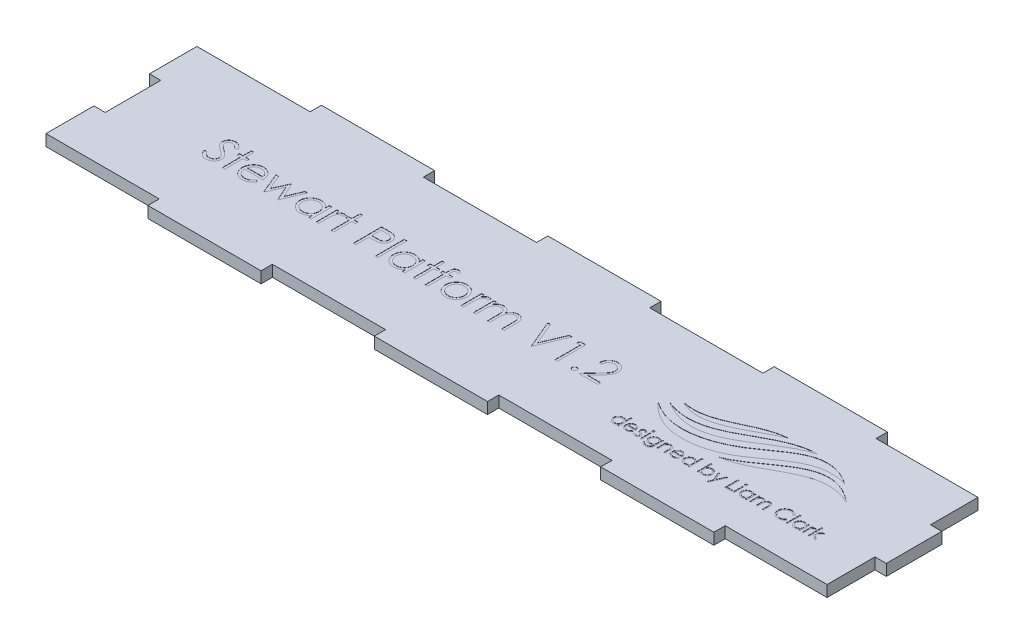
from build123d import *

# Parameters (mm, degrees)
SKETCH1_W           = 420
SKETCH1_H           = 92
BOSS_EXTRUDE1_DEPTH = 6
SKETCH2_W           = 60
SKETCH2_H           = 6
CUT_EXTRUDE1_DEPTH  = 216.062781531
SKETCH4_W           = 6
SKETCH4_H           = 29.452064288
SKETCH4_H_2         = 29.172108846
SKETCH4_H_3         = 29.375826866
CUT_EXTRUDE2_DEPTH  = 216.062781531
SKETCH7_W           = 0.628205128
SKETCH7_H           = 5.115384616
SKETCH7_W_2         = 0.628205129
SKETCH7_H_2         = 7.17948718
SKETCH7_W_3         = 1.346153846
SKETCH7_H_3         = 15.384615384
CUT_EXTRUDE5_DEPTH  = 0.1


with BuildPart() as part:
    # Sketch1 → Boss-Extrude1 (new body)
    with BuildSketch(Plane(origin=(0, 0, 0), x_dir=(1, 0, 0), z_dir=(0, 1, 0))):
        Rectangle(SKETCH1_W, SKETCH1_H)
    extrude(amount=BOSS_EXTRUDE1_DEPTH)

    # Sketch2 → Cut-Extrude1 (cut, through all)
    with BuildSketch(Plane(origin=(0, 6, 0), x_dir=(1, 0, 0), z_dir=(0, 1, 0))):
        with Locations((-180, 43)):
            Rectangle(SKETCH2_W, SKETCH2_H)
        with Locations((-60, 43)):
            Rectangle(SKETCH2_W, SKETCH2_H)
        with Locations((60, 43)):
            Rectangle(SKETCH2_W, SKETCH2_H)
        with Locations((-60, -43)):
            Rectangle(SKETCH2_W, SKETCH2_H)
        with Locations((60, -43)):
            Rectangle(SKETCH2_W, SKETCH2_H)
        with Locations((-180, -43)):
            Rectangle(SKETCH2_W, SKETCH2_H)
        with Locations((180, 43)):
            Rectangle(SKETCH2_W, SKETCH2_H)
        with Locations((180, -43)):
            Rectangle(SKETCH2_W, SKETCH2_H)
    extrude(amount=-CUT_EXTRUDE1_DEPTH, mode=Mode.SUBTRACT)

    # Sketch4 → Cut-Extrude2 (cut, through all)
    with BuildSketch(Plane(origin=(0, 6, 0), x_dir=(1, 0, 0), z_dir=(0, 1, 0))):
        with Locations((-207, 0.10185901)):
            Rectangle(SKETCH4_W, SKETCH4_H)
        with Locations((207, 29.413945577)):
            Rectangle(SKETCH4_W, SKETCH4_H_2)
        with Locations((207, -29.312086567)):
            Rectangle(SKETCH4_W, SKETCH4_H_3)
    extrude(amount=-CUT_EXTRUDE2_DEPTH, mode=Mode.SUBTRACT)

    # Sketch7 → Cut-Extrude5 (cut)
    # profile 1 of 44: a face of its own
    with BuildSketch(Plane(origin=(0, 6, 0), x_dir=(1, 0, 0), z_dir=(0, 1, 0))):
        with BuildLine():
            add(Edge.make_bspline(
                [(171.36444099, 2.90413346), (149.140699701, 21.509675834), (134.836671219, -3.659735706), (116.633356268, -10.255371187)],
                knots=[0, 0, 0, 0, 1, 1, 1, 1], degree=3))
            add(Edge.make_bspline(
                [(171.36444099, 2.90413346), (149.464567082, 13.380234166), (136.000295933, -7.590750058), (116.633356268, -10.255371187)],
                knots=[0, 0, 0, 0, 1, 1, 1, 1], degree=3))
        make_face()
    # profile 2 of 44: a face of its own
    with BuildSketch(Plane(origin=(0, 6, 0), x_dir=(1, 0, 0), z_dir=(0, 1, 0))):
        with BuildLine():
            add(Edge.make_bspline(
                [(162.725301101, 10.827839004), (143.110796492, 16.536934072), (123.530342035, -12.875487232), (86.357136777, -14.160858771), (75.376163002, -0.805365757)],
                knots=[0, 0, 0, 0, 0.516039473, 1, 1, 1, 1], degree=3))
            add(Edge.make_bspline(
                [(162.725301101, 10.827839004), (143.62649508, 23.648861418), (123.05671052, -4.363500159), (87.925312639, -10.499599158), (75.376163002, -0.805365757)],
                knots=[0, 0, 0, 0, 0.521405392, 1, 1, 1, 1], degree=3))
        make_face()
    # profile 3 of 44: a face of its own
    with BuildSketch(Plane(origin=(0, 6, 0), x_dir=(1, 0, 0), z_dir=(0, 1, 0))):
        with BuildLine():
            add(Edge.make_bspline(
                [(142.089999289, 17.458246428), (120.565084965, 11.531348312), (105.026881389, -14.330834341), (78.559141949, 1.941323025)],
                knots=[0, 0, 0, 0, 1, 1, 1, 1], degree=3))
            add(Edge.make_bspline(
                [(142.089999289, 17.458246428), (118.744018259, 17.229072164), (104.487942746, -8.442125783), (78.559141949, 1.941323025)],
                knots=[0, 0, 0, 0, 1, 1, 1, 1], degree=3))
        make_face()
    # profile 4 of 44: a face of its own
    with BuildSketch(Plane(origin=(0, 6, 0), x_dir=(1, 0, 0), z_dir=(0, 1, 0))):
        with BuildLine():
            add(Edge.make_bspline(
                [(126.709688129, 16.942948663), (113.340641, 11.817350579), (97.858360392, -2.635598225), (82.157668814, 5.663937023)],
                knots=[0, 0, 0, 0, 1, 1, 1, 1], degree=3))
            add(Edge.make_bspline(
                [(126.709688129, 16.942948663), (110.860022696, 15.90880353), (98.991216551, 1.667298017), (82.157668814, 5.663937023)],
                knots=[0, 0, 0, 0, 1, 1, 1, 1], degree=3))
        make_face()
    # profile 5 of 44: a face of its own
    with BuildSketch(Plane(origin=(0, 6, 0), x_dir=(1, 0, 0), z_dir=(0, 1, 0))):
        with BuildLine():
            Line((76.089298845, -15.353410049), (76.089298845, -22.532897229))
            Line((76.089298845, -22.532897229), (75.461093717, -22.532897229))
            Line((75.461093717, -22.532897229), (75.461093717, -21.648081524))
            add(Edge.make_bspline(
                [(75.461093717, -21.648081524), (75.390256136, -21.728160711), (75.252015705, -21.884436254), (75.021133469, -22.088600599), (74.776397113, -22.257357242), (74.518994471, -22.393657073), (74.249157984, -22.496041186), (73.96748581, -22.568813504), (73.673863048, -22.615601174), (73.473358339, -22.620273218), (73.371750768, -22.622640818)],
                knots=[0, 0, 0, 0, 1.074387032, 2.096679803, 3.090159297, 4.057316773, 5.018401886, 5.985159533, 6.978961417, 8, 8, 8, 8], degree=3))
            add(Edge.make_bspline(
                [(73.371750768, -22.622640818), (73.281414861, -22.620188074), (73.103268451, -22.615351153), (72.841210297, -22.577826546), (72.589025798, -22.517565302), (72.346476652, -22.433763524), (72.115132361, -22.32260188), (71.893012168, -22.189519384), (71.681266784, -22.031037724), (71.483123706, -21.849861667), (71.300659705, -21.653071693), (71.14053716, -21.443180599), (71.007031, -21.221095991), (70.895390839, -20.989629684), (70.80939815, -20.746999845), (70.749450882, -20.494045509), (70.711969988, -20.231065762), (70.707135067, -20.051986715), (70.704683461, -19.961182485)],
                knots=[0, 0, 0, 0, 1.033919861, 2.038935746, 3.024066025, 3.998881131, 4.97069526, 5.957263378, 6.95902576, 7.993208707, 9.027059324, 10.027763471, 11.009749337, 11.988697705, 12.965288445, 13.950418724, 14.960734635, 16, 16, 16, 16], degree=3))
            add(Edge.make_bspline(
                [(70.704683461, -19.961182485), (70.707189403, -19.872255078), (70.712143517, -19.696450391), (70.749049957, -19.437892995), (70.811111974, -19.188856474), (70.898207669, -18.950142587), (71.009891579, -18.721462487), (71.145747753, -18.502654437), (71.305786003, -18.293115642), (71.490290817, -18.097773188), (71.690160357, -17.91733196), (71.903977819, -17.760513869), (72.126424382, -17.625080171), (72.360950403, -17.517773219), (72.604084612, -17.43095501), (72.857991504, -17.370889074), (73.121614661, -17.335494431), (73.300595645, -17.330368903), (73.391382179, -17.327769024)],
                knots=[0, 0, 0, 0, 1.020392517, 2.01726096, 2.990465484, 3.961182959, 4.928053699, 5.906110375, 6.912531644, 7.948652711, 8.985773172, 9.998621852, 10.987621588, 11.969261332, 12.953316658, 13.946091881, 14.958173133, 16, 16, 16, 16], degree=3))
            add(Edge.make_bspline(
                [(73.391382179, -17.327769024), (73.495815794, -17.330903216), (73.700807375, -17.337055286), (74.000604418, -17.38846802), (74.284179639, -17.474793776), (74.553165614, -17.592976339), (74.805958735, -17.746577841), (75.044412016, -17.932080737), (75.264378662, -18.154735029), (75.394522307, -18.321958176), (75.461093717, -18.407496588)],
                knots=[0, 0, 0, 0, 1.031072012, 2.023879775, 2.993683497, 3.952812103, 4.918022106, 5.908088563, 6.929940113, 8, 8, 8, 8], degree=3))
            Line((75.461093717, -18.407496588), (75.461093717, -15.353410049))
            Line((75.461093717, -15.353410049), (76.089298845, -15.353410049))
        make_face()
        with BuildLine():
            add(Edge.make_bspline(
                [(73.39979564, -17.955974152), (73.307966964, -17.959241427), (73.126711764, -17.965690509), (72.86062376, -18.0160375), (72.605996932, -18.099806688), (72.364104784, -18.214370491), (72.13876835, -18.358427964), (71.937381009, -18.532670731), (71.758295606, -18.732344759), (71.607679077, -18.95654898), (71.484898084, -19.196905162), (71.39856402, -19.448154038), (71.341625525, -19.705763993), (71.335808484, -19.880489365), (71.332888589, -19.968193703)],
                knots=[0, 0, 0, 0, 1.031046209, 2.035121221, 3.029706178, 4.034933723, 5.034054252, 6.02443088, 7.017295772, 8.038157696, 9.050218397, 10.03989886, 11.016116709, 12, 12, 12, 12], degree=3))
            add(Edge.make_bspline(
                [(71.332888589, -19.968193703), (71.336618375, -20.055373917), (71.344063329, -20.229392629), (71.397564718, -20.487353783), (71.487324465, -20.738661867), (71.60980859, -20.981183854), (71.76318184, -21.206352055), (71.940959145, -21.4098323), (72.144859707, -21.584811476), (72.370714722, -21.731286623), (72.611930662, -21.849611665), (72.865598525, -21.931942944), (73.126949802, -21.985098505), (73.304654469, -21.991307459), (73.394186666, -21.99443569)],
                knots=[0, 0, 0, 0, 0.979072187, 1.954306742, 2.945804271, 3.96968567, 4.997920485, 5.998718438, 6.996577872, 8.005894225, 9.015743152, 10.005417472, 10.995077863, 12, 12, 12, 12], degree=3))
            add(Edge.make_bspline(
                [(73.394186666, -21.99443569), (73.485079671, -21.991115762), (73.665856844, -21.984512755), (73.93273426, -21.933950225), (74.191724186, -21.850412628), (74.439298642, -21.734614374), (74.669930905, -21.591099663), (74.87692666, -21.42308548), (75.051958597, -21.227679112), (75.200343816, -21.012926206), (75.316694649, -20.777502213), (75.401446768, -20.526833832), (75.451554579, -20.260912335), (75.457870038, -20.079184482), (75.461093717, -19.98642287)],
                knots=[0, 0, 0, 0, 1.01762866, 2.023962475, 3.030623092, 4.058876274, 5.077231937, 6.066672613, 7.034107872, 8.005628644, 8.981990164, 9.965428785, 10.961468474, 12, 12, 12, 12], degree=3))
            add(Edge.make_bspline(
                [(75.461093717, -19.98642287), (75.459174404, -19.915747209), (75.455396589, -19.776635142), (75.42653545, -19.572380107), (75.380625597, -19.376912655), (75.315933257, -19.190027277), (75.230950689, -19.012757246), (75.128455157, -18.843829725), (75.006644257, -18.684123303), (74.867478865, -18.535837161), (74.71514846, -18.400584236), (74.553959379, -18.279855755), (74.382001885, -18.180678209), (74.202167811, -18.098595666), (74.014145142, -18.033277366), (73.816403903, -17.989701979), (73.611045929, -17.959781337), (73.470953818, -17.957256575), (73.39979564, -17.955974152)],
                knots=[0, 0, 0, 0, 1.050140795, 2.067009409, 3.05949893, 4.030605086, 5.00011959, 5.97591094, 6.962425594, 7.979863591, 8.993523472, 9.986985069, 10.967611495, 11.937549037, 12.921786183, 13.919465291, 14.943216303, 16, 16, 16, 16], degree=3))
        make_face(mode=Mode.SUBTRACT)
    # profile 6 of 44: a face of its own
    with BuildSketch(Plane(origin=(0, 6, 0), x_dir=(1, 0, 0), z_dir=(0, 1, 0))):
        with BuildLine():
            Line((81.723513589, -20.917512613), (82.281606537, -21.210581524))
            add(Edge.make_bspline(
                [(82.281606537, -21.210581524), (82.237133347, -21.289468186), (82.15060613, -21.442950392), (82.001804634, -21.653814113), (81.845820489, -21.843509544), (81.675612553, -22.006968853), (81.496273195, -22.149471623), (81.306807886, -22.274147272), (81.10623025, -22.380384313), (80.894530801, -22.469889369), (80.669931698, -22.538708357), (80.431888665, -22.587316799), (80.179945675, -22.617363336), (80.007253315, -22.620853618), (79.918826089, -22.622640818)],
                knots=[0, 0, 0, 0, 1.120438281, 2.179929193, 3.190490725, 4.156257408, 5.095198341, 6.022838206, 6.959905092, 7.901321166, 8.864066838, 9.862729781, 10.905609505, 12, 12, 12, 12], degree=3))
            add(Edge.make_bspline(
                [(79.918826089, -22.622640818), (79.820542134, -22.620346468), (79.62881861, -22.615870854), (79.349739116, -22.577285925), (79.086980279, -22.514341208), (78.840556873, -22.426410125), (78.611072367, -22.311555477), (78.398070658, -22.171636513), (78.200431606, -22.007372004), (78.024383188, -21.817339117), (77.865895422, -21.613975202), (77.726043782, -21.402063433), (77.60912892, -21.182136984), (77.5140237, -20.955595936), (77.43721397, -20.723868149), (77.383680562, -20.484845214), (77.352821066, -20.239174046), (77.348092175, -20.072979374), (77.345709102, -19.989227357)],
                knots=[0, 0, 0, 0, 1.145258523, 2.234067595, 3.276747158, 4.290159414, 5.277019952, 6.260822364, 7.254936242, 8.264827045, 9.274100331, 10.257902744, 11.220704747, 12.172965371, 13.118907548, 14.062713208, 15.023725156, 16, 16, 16, 16], degree=3))
            add(Edge.make_bspline(
                [(77.345709102, -19.989227357), (77.347827384, -19.910637696), (77.352025541, -19.754883367), (77.378487116, -19.524352278), (77.425383702, -19.300295373), (77.48973635, -19.082526477), (77.572838842, -18.871410209), (77.67450328, -18.666818081), (77.794888036, -18.468967802), (77.887833383, -18.344161534), (77.934651409, -18.281294665)],
                knots=[0, 0, 0, 0, 1.024358464, 2.0301432, 3.019427413, 4.004406732, 4.986367066, 5.972626655, 6.978780325, 8, 8, 8, 8], degree=3))
            add(Edge.make_bspline(
                [(77.934651409, -18.281294665), (77.998066775, -18.205556924), (78.122888668, -18.056480623), (78.334001379, -17.860603972), (78.562601771, -17.696516422), (78.805825024, -17.560502149), (79.066497972, -17.457154855), (79.341116554, -17.380139691), (79.632807726, -17.336983669), (79.832218168, -17.330888002), (79.934250768, -17.327769024)],
                knots=[0, 0, 0, 0, 1.030682036, 2.02871468, 2.997146059, 3.962720338, 4.930598197, 5.918074684, 6.934738563, 8, 8, 8, 8], degree=3))
            add(Edge.make_bspline(
                [(79.934250768, -17.327769024), (80.039145979, -17.330477121), (80.244926471, -17.335789792), (80.544990713, -17.385042459), (80.828912146, -17.463147568), (81.096577155, -17.573455149), (81.348012876, -17.715774252), (81.581584975, -17.892057935), (81.801288, -18.09689411), (81.929105158, -18.254420529), (81.994146602, -18.334579921)],
                knots=[0, 0, 0, 0, 1.056321875, 2.072262726, 3.055038591, 4.01806755, 4.982017516, 5.957941055, 6.960871419, 8, 8, 8, 8], degree=3))
            add(Edge.make_bspline(
                [(81.994146602, -18.334579921), (82.038400478, -18.394987084), (82.126613664, -18.515399321), (82.237107864, -18.711741635), (82.333022654, -18.917162824), (82.409688576, -19.134983418), (82.471767579, -19.362622579), (82.516681216, -19.601707668), (82.543020454, -19.852167491), (82.548197848, -20.022820602), (82.550837307, -20.109820306)],
                knots=[0, 0, 0, 0, 0.94817472, 1.890038105, 2.849395472, 3.817997239, 4.812318967, 5.836947057, 6.897266129, 8, 8, 8, 8], degree=3))
            Line((82.550837307, -20.109820306), (77.97391423, -20.109820306))
            add(Edge.make_bspline(
                [(77.97391423, -20.109820306), (77.976993443, -20.177221234), (77.983048591, -20.309762442), (78.011278877, -20.503704008), (78.055776424, -20.688450692), (78.11831455, -20.862616776), (78.19404824, -21.028477031), (78.286819674, -21.184801105), (78.397498782, -21.330876965), (78.52095018, -21.46801124), (78.658364371, -21.590132763), (78.802929866, -21.699436315), (78.956716996, -21.791047509), (79.118513163, -21.865407288), (79.288056733, -21.92361992), (79.465401123, -21.963355561), (79.650197356, -21.989969775), (79.776168824, -21.992929106), (79.840300448, -21.99443569)],
                knots=[0, 0, 0, 0, 1.094153842, 2.151609401, 3.174256925, 4.172055639, 5.149267565, 6.128595816, 7.11444997, 8.118368179, 9.117203808, 10.09244225, 11.054858984, 12.015122123, 12.976791628, 13.957293641, 14.960065497, 16, 16, 16, 16], degree=3))
            add(Edge.make_bspline(
                [(79.840300448, -21.99443569), (79.903002743, -21.993219577), (80.027416125, -21.990806575), (80.212697839, -21.967342753), (80.394976894, -21.929402202), (80.573498861, -21.877622222), (80.744640553, -21.814468517), (80.903131653, -21.738262802), (81.048892084, -21.653963309), (81.185126017, -21.557543958), (81.317268004, -21.439527584), (81.448352977, -21.292256142), (81.588906283, -21.118081087), (81.676885469, -20.986989755), (81.723513589, -20.917512613)],
                knots=[0, 0, 0, 0, 0.99110716, 1.966546729, 2.947904876, 3.932708344, 4.903319531, 5.828989031, 6.710028674, 7.56322171, 8.463672341, 9.504779593, 10.677557249, 12, 12, 12, 12], degree=3))
        make_face()
        with BuildLine():
            add(Edge.make_bspline(
                [(81.922632179, -19.481615177), (81.899638929, -19.39828943), (81.855384326, -19.237914189), (81.762911598, -19.015832408), (81.658768516, -18.818456606), (81.535525053, -18.64729734), (81.395887602, -18.495290314), (81.234597237, -18.362453143), (81.05372545, -18.243618241), (80.854207169, -18.143313242), (80.642923598, -18.057933525), (80.421711214, -18.000683293), (80.195995639, -17.961464209), (80.043327066, -17.957811992), (79.966502371, -17.955974152)],
                knots=[0, 0, 0, 0, 1.154881502, 2.222775134, 3.210006277, 4.132804581, 5.035138423, 5.962687519, 6.919655026, 7.923214229, 8.944639381, 9.960483929, 10.97369054, 12, 12, 12, 12], degree=3))
            add(Edge.make_bspline(
                [(79.966502371, -17.955974152), (79.903803494, -17.957197495), (79.779860996, -17.959615787), (79.597258859, -17.982556046), (79.421899461, -18.020475735), (79.252488886, -18.072405649), (79.091247149, -18.141622854), (78.934857613, -18.222789307), (78.787296821, -18.321872474), (78.69501423, -18.397390184), (78.648393396, -18.435541459)],
                knots=[0, 0, 0, 0, 1.04873581, 2.073130211, 3.073294108, 4.04793562, 5.032784715, 6.005352987, 6.992311501, 8, 8, 8, 8], degree=3))
            add(Edge.make_bspline(
                [(78.648393396, -18.435541459), (78.615006833, -18.465730091), (78.547440564, -18.526824523), (78.457159521, -18.632082936), (78.370718576, -18.74558606), (78.29205127, -18.871676309), (78.219896097, -19.008917867), (78.152376143, -19.156153138), (78.091603319, -19.314499398), (78.057411099, -19.424844277), (78.039819679, -19.481615177)],
                knots=[0, 0, 0, 0, 0.879870761, 1.780643979, 2.707998968, 3.669668524, 4.684282772, 5.740141944, 6.837334558, 8, 8, 8, 8], degree=3))
            Line((78.039819679, -19.481615177), (81.922632179, -19.481615177))
        make_face(mode=Mode.SUBTRACT)
    # profile 7 of 44: a face of its own
    with BuildSketch(Plane(origin=(0, 6, 0), x_dir=(1, 0, 0), z_dir=(0, 1, 0))):
        with BuildLine():
            Line((86.230324486, -18.055533447), (85.804042435, -18.49443569))
            add(Edge.make_bspline(
                [(85.804042435, -18.49443569), (85.767261428, -18.451809398), (85.696351976, -18.369630923), (85.583889014, -18.25975679), (85.471841807, -18.167482913), (85.36174418, -18.089578395), (85.250827642, -18.030680101), (85.140393806, -17.987690378), (85.030328329, -17.961086766), (84.956756258, -17.957657889), (84.920628973, -17.955974152)],
                knots=[0, 0, 0, 0, 1.26578478, 2.440284043, 3.530471711, 4.527705817, 5.468200915, 6.346673037, 7.188140097, 8, 8, 8, 8], degree=3))
            add(Edge.make_bspline(
                [(84.920628973, -17.955974152), (84.876350194, -17.958123898), (84.789215822, -17.962354293), (84.664364185, -18.004581154), (84.548462935, -18.069398631), (84.448148975, -18.161335798), (84.363173615, -18.266864336), (84.301146253, -18.384856986), (84.263214286, -18.511753073), (84.258404822, -18.599812788), (84.255965512, -18.644475754)],
                knots=[0, 0, 0, 0, 0.99966794, 1.967205029, 2.953328237, 3.988086729, 5.028030931, 6.008226631, 6.989793394, 8, 8, 8, 8], degree=3))
            add(Edge.make_bspline(
                [(84.255965512, -18.644475754), (84.258187136, -18.684899843), (84.262624123, -18.765634064), (84.297117481, -18.884730132), (84.352049625, -19.000844208), (84.403390014, -19.071970021), (84.429843717, -19.108618382)],
                knots=[0, 0, 0, 0, 0.960159726, 1.917612774, 2.927026955, 4, 4, 4, 4], degree=3))
            add(Edge.make_bspline(
                [(84.429843717, -19.108618382), (84.445770705, -19.128187551), (84.47966929, -19.16983806), (84.54328632, -19.227645767), (84.615331326, -19.291530269), (84.701971201, -19.355403943), (84.799473257, -19.422667393), (84.909951825, -19.490671659), (85.029900835, -19.564600509), (85.115775449, -19.61148938), (85.160412627, -19.635861972)],
                knots=[0, 0, 0, 0, 0.66740084, 1.420478572, 2.27185888, 3.217733974, 4.268547843, 5.408967954, 6.65319498, 8, 8, 8, 8], degree=3))
            add(Edge.make_bspline(
                [(85.160412627, -19.635861972), (85.214839781, -19.666351778), (85.319975122, -19.725248043), (85.469360656, -19.81666745), (85.604934738, -19.907530298), (85.727846073, -19.996864846), (85.835729691, -20.087170581), (85.931858796, -20.174986095), (86.013835684, -20.262964712), (86.059743537, -20.324430939), (86.081686666, -20.35381069)],
                knots=[0, 0, 0, 0, 1.27191281, 2.456916733, 3.569705269, 4.599008579, 5.553216877, 6.436649441, 7.252746552, 8, 8, 8, 8], degree=3))
            add(Edge.make_bspline(
                [(86.081686666, -20.35381069), (86.118107721, -20.413142866), (86.190592379, -20.531224909), (86.266708912, -20.725661763), (86.310829462, -20.931882768), (86.316953902, -21.072947208), (86.320068076, -21.144676075)],
                knots=[0, 0, 0, 0, 0.995354457, 1.980940102, 2.973342416, 4, 4, 4, 4], degree=3))
            add(Edge.make_bspline(
                [(86.320068076, -21.144676075), (86.318629008, -21.195214367), (86.315793168, -21.294805594), (86.296077034, -21.441475253), (86.262167082, -21.581744368), (86.215979574, -21.717134937), (86.153610828, -21.845052817), (86.080515234, -21.968725315), (85.99276541, -22.085477176), (85.892582659, -22.195155097), (85.782891671, -22.295326591), (85.665879394, -22.383374499), (85.541401733, -22.456523174), (85.41034813, -22.517053864), (85.272420822, -22.56519038), (85.127598244, -22.598515442), (84.976340734, -22.618460965), (84.873481118, -22.621229917), (84.821069679, -22.622640818)],
                knots=[0, 0, 0, 0, 1.032770009, 2.035186124, 3.017557409, 3.978232242, 4.952395191, 5.920591857, 6.910227898, 7.931268572, 8.952309245, 9.941945286, 10.918353717, 11.897095711, 12.887975737, 13.898235213, 14.929059601, 16, 16, 16, 16], degree=3))
            add(Edge.make_bspline(
                [(84.821069679, -22.622640818), (84.750335328, -22.620655418), (84.609849474, -22.616712203), (84.402070035, -22.579700081), (84.199028518, -22.522109293), (84.002261438, -22.442677425), (83.81616921, -22.342375999), (83.645907361, -22.222251212), (83.490884436, -22.086271217), (83.402647888, -21.982045396), (83.358529614, -21.929932485)],
                knots=[0, 0, 0, 0, 1.013940152, 2.01379169, 3.017749504, 4.037548394, 5.051665909, 6.043208538, 7.021604269, 8, 8, 8, 8], degree=3))
            Line((83.358529614, -21.929932485), (83.774995961, -21.455974152))
            add(Edge.make_bspline(
                [(83.774995961, -21.455974152), (83.814540787, -21.498683681), (83.891204411, -21.581482561), (84.013806845, -21.691731242), (84.138565647, -21.784133784), (84.26423502, -21.861420614), (84.392675209, -21.92097142), (84.523166437, -21.962808608), (84.655443285, -21.989696992), (84.744287557, -21.992853557), (84.788818076, -21.99443569)],
                knots=[0, 0, 0, 0, 1.179806542, 2.287233372, 3.337373186, 4.324005949, 5.273901747, 6.200048787, 7.097828587, 8, 8, 8, 8], degree=3))
            add(Edge.make_bspline(
                [(84.788818076, -21.99443569), (84.849453928, -21.99169404), (84.967926211, -21.986337317), (85.137613728, -21.937703133), (85.294290981, -21.861443229), (85.430337672, -21.753273833), (85.546141994, -21.627362688), (85.629998343, -21.485534449), (85.682550694, -21.331951536), (85.688722691, -21.22548693), (85.691862948, -21.171318703)],
                knots=[0, 0, 0, 0, 1.072336372, 2.095165389, 3.102688358, 4.141489647, 5.156069229, 6.117746104, 7.042326257, 8, 8, 8, 8], degree=3))
            add(Edge.make_bspline(
                [(85.691862948, -21.171318703), (85.689690359, -21.126699466), (85.685400874, -21.038604754), (85.65171433, -20.911104072), (85.598488625, -20.790165511), (85.546079328, -20.719386216), (85.519386986, -20.683337934)],
                knots=[0, 0, 0, 0, 1.013901739, 2.00181326, 2.98231254, 4, 4, 4, 4], degree=3))
            add(Edge.make_bspline(
                [(85.519386986, -20.683337934), (85.503342197, -20.665267209), (85.468390852, -20.625902645), (85.40428037, -20.569052488), (85.327516645, -20.507776289), (85.23723632, -20.443113112), (85.133257396, -20.375915901), (85.015158445, -20.306537196), (84.88455734, -20.231681745), (84.792216077, -20.182042434), (84.743946281, -20.156094344)],
                knots=[0, 0, 0, 0, 0.615000592, 1.339693406, 2.178160186, 3.116406724, 4.166410947, 5.330106347, 6.604359322, 8, 8, 8, 8], degree=3))
            add(Edge.make_bspline(
                [(84.743946281, -20.156094344), (84.691853001, -20.127016081), (84.590827506, -20.070624048), (84.447732924, -19.982791888), (84.318638216, -19.893457338), (84.200437067, -19.80763166), (84.096115055, -19.720789772), (84.006083159, -19.632835269), (83.926796727, -19.547315297), (83.882901903, -19.486720704), (83.861935063, -19.457777036)],
                knots=[0, 0, 0, 0, 1.262093308, 2.447601706, 3.550203992, 4.582594899, 5.537233252, 6.418365656, 7.244515135, 8, 8, 8, 8], degree=3))
            add(Edge.make_bspline(
                [(83.861935063, -19.457777036), (83.825673864, -19.399485806), (83.753138793, -19.282882976), (83.682708411, -19.088262022), (83.634296353, -18.883371908), (83.629971573, -18.741998199), (83.627760384, -18.669716139)],
                knots=[0, 0, 0, 0, 0.985009483, 1.970363186, 2.962279964, 4, 4, 4, 4], degree=3))
            add(Edge.make_bspline(
                [(83.627760384, -18.669716139), (83.628828774, -18.622465343), (83.630919766, -18.529988841), (83.647607869, -18.3941112), (83.677991292, -18.265014893), (83.716101137, -18.140761167), (83.769067146, -18.023756979), (83.832358956, -17.912442037), (83.906733806, -17.806970201), (83.992420388, -17.708963936), (84.086633678, -17.619945284), (84.188423218, -17.542348028), (84.295499731, -17.476135318), (84.40831657, -17.420604997), (84.527957516, -17.378602232), (84.653586288, -17.349687462), (84.784948598, -17.330377056), (84.87475085, -17.328650888), (84.920628973, -17.327769024)],
                knots=[0, 0, 0, 0, 1.087655834, 2.128696564, 3.144119009, 4.137814668, 5.115653402, 6.093965665, 7.082169637, 8.081268856, 9.086088321, 10.061021666, 11.022561449, 11.980240094, 12.950172527, 13.934149372, 14.944599409, 16, 16, 16, 16], degree=3))
            add(Edge.make_bspline(
                [(84.920628973, -17.327769024), (84.9750131, -17.329977705), (85.084801544, -17.3344365), (85.249510796, -17.369847881), (85.41397748, -17.42811409), (85.57862418, -17.508586556), (85.742244759, -17.612720308), (85.906278472, -17.738578907), (86.072694533, -17.885334336), (86.176607159, -17.997532787), (86.230324486, -18.055533447)],
                knots=[0, 0, 0, 0, 0.845714091, 1.707292901, 2.609013841, 3.555613372, 4.552488639, 5.621697636, 6.770543573, 8, 8, 8, 8], degree=3))
        make_face()
    # profile 8 of 44: a face of its own
    with BuildSketch(Plane(origin=(0, 6, 0), x_dir=(1, 0, 0), z_dir=(0, 1, 0))):
        with BuildLine():
            add(Edge.make_bspline(
                [(87.79803282, -15.263666459), (87.837015451, -15.265474764), (87.913350931, -15.269015772), (88.023737466, -15.299338726), (88.12425149, -15.350738097), (88.213406956, -15.419697459), (88.289910729, -15.500796346), (88.34347215, -15.595318283), (88.377896942, -15.69743556), (88.382054053, -15.768665739), (88.38417064, -15.804932485)],
                knots=[0, 0, 0, 0, 1.055194115, 2.066272739, 3.074728998, 4.095836921, 5.109056067, 6.073838105, 7.019297344, 8, 8, 8, 8], degree=3))
            add(Edge.make_bspline(
                [(88.38417064, -15.804932485), (88.38200632, -15.840257791), (88.377727717, -15.910091741), (88.34349874, -16.010438686), (88.289454264, -16.103647252), (88.213456013, -16.184588673), (88.124238491, -16.253509913), (88.023740919, -16.304919391), (87.913350022, -16.335239665), (87.837015144, -16.338781043), (87.79803282, -16.340589536)],
                knots=[0, 0, 0, 0, 0.96129708, 1.900370562, 2.859976407, 3.87933698, 4.906634145, 5.921202961, 6.938410037, 8, 8, 8, 8], degree=3))
            add(Edge.make_bspline(
                [(87.79803282, -16.340589536), (87.759496269, -16.338850096), (87.684489909, -16.335464502), (87.575756224, -16.304324467), (87.476099245, -16.253492321), (87.3867699, -16.18503995), (87.312309514, -16.103150156), (87.258112863, -16.010495568), (87.223962939, -15.910077259), (87.219673682, -15.840252926), (87.217503973, -15.804932485)],
                knots=[0, 0, 0, 0, 1.054934014, 2.053291228, 3.073705704, 4.106921865, 5.123545215, 6.088680038, 7.033164197, 8, 8, 8, 8], degree=3))
            add(Edge.make_bspline(
                [(87.217503973, -15.804932485), (87.219626147, -15.768670786), (87.223794229, -15.697450521), (87.258138461, -15.595260455), (87.311858077, -15.501297451), (87.386819204, -15.419246452), (87.476086124, -15.350755583), (87.575759614, -15.29993362), (87.684489013, -15.268790941), (87.759495965, -15.265405712), (87.79803282, -15.263666459)],
                knots=[0, 0, 0, 0, 0.98631895, 1.937192651, 2.907499808, 3.917963147, 4.944918757, 5.95915025, 6.951458133, 8, 8, 8, 8], degree=3))
        make_face()
    # profile 9 of 44: a face of its own
    with BuildSketch(Plane(origin=(0, 6, 0), x_dir=(1, 0, 0), z_dir=(0, 1, 0))):
        with Locations((87.800837307, -19.975204921)):
            Rectangle(SKETCH7_W, SKETCH7_H)
    # profile 10 of 44: a face of its own
    with BuildSketch(Plane(origin=(0, 6, 0), x_dir=(1, 0, 0), z_dir=(0, 1, 0))):
        with BuildLine():
            Line((94.127760384, -17.417512613), (94.755965512, -17.417512613))
            Line((94.755965512, -17.417512613), (94.755965512, -21.477007806))
            add(Edge.make_bspline(
                [(94.755965512, -21.477007806), (94.755411427, -21.563482995), (94.754341909, -21.73040094), (94.746639966, -21.971757499), (94.730398612, -22.19468967), (94.711981249, -22.400214188), (94.685487817, -22.587378408), (94.653135082, -22.756740817), (94.616663724, -22.908463942), (94.584623289, -23.001913624), (94.569467114, -23.046118382)],
                knots=[0, 0, 0, 0, 1.307562039, 2.523909702, 3.650326591, 4.686913197, 5.643429486, 6.506965704, 7.293745905, 8, 8, 8, 8], degree=3))
            add(Edge.make_bspline(
                [(94.569467114, -23.046118382), (94.547088637, -23.103578226), (94.503000784, -23.2167799), (94.420429517, -23.377248541), (94.32796171, -23.528341321), (94.222348209, -23.669216224), (94.104066601, -23.799166048), (93.975903616, -23.921014047), (93.835363233, -24.032182382), (93.682525809, -24.130752977), (93.520914543, -24.219527085), (93.350622338, -24.296420219), (93.172609462, -24.363393907), (92.985203679, -24.413559498), (92.79134321, -24.457028939), (92.588748347, -24.485318311), (92.378602754, -24.504572427), (92.235711994, -24.506352893), (92.163217114, -24.507256203)],
                knots=[0, 0, 0, 0, 0.981931301, 1.934503488, 2.87077864, 3.801706999, 4.735015492, 5.667491629, 6.616593066, 7.585388521, 8.561939025, 9.551802639, 10.560317337, 11.588439944, 12.640189604, 13.723962949, 14.845264515, 16, 16, 16, 16], degree=3))
            add(Edge.make_bspline(
                [(92.163217114, -24.507256203), (92.057447645, -24.505543231), (91.850851455, -24.502197338), (91.549641469, -24.463215507), (91.26357203, -24.408106761), (90.996423116, -24.324695906), (90.749882922, -24.222621927), (90.525635171, -24.105432021), (90.325692956, -23.971053403), (90.14544561, -23.818052201), (89.98276243, -23.636124838), (89.82970785, -23.42172715), (89.682385966, -23.171593371), (89.596048691, -22.988007945), (89.550837307, -22.891871588)],
                knots=[0, 0, 0, 0, 1.157897085, 2.2616841, 3.32207898, 4.345638746, 5.321241055, 6.241986252, 7.112515963, 7.955008012, 8.825025602, 9.77857164, 10.836726669, 12, 12, 12, 12], degree=3))
            Line((89.550837307, -22.891871588), (90.179042435, -22.891871588))
            add(Edge.make_bspline(
                [(90.179042435, -22.891871588), (90.229566854, -22.972083339), (90.32833587, -23.128887436), (90.513032832, -23.331913748), (90.715445485, -23.505420477), (90.942404851, -23.645242026), (91.194855282, -23.750661608), (91.472948654, -23.825812201), (91.778947898, -23.870804735), (91.991984326, -23.876227323), (92.10292064, -23.879051075)],
                knots=[0, 0, 0, 0, 0.997731894, 1.950442991, 2.880492273, 3.800895997, 4.748200782, 5.754801363, 6.83083817, 8, 8, 8, 8], degree=3))
            add(Edge.make_bspline(
                [(92.10292064, -23.879051075), (92.212454421, -23.876190777), (92.423624586, -23.87067641), (92.727286924, -23.825792121), (93.0044768, -23.750645254), (93.253597202, -23.645428481), (93.471708739, -23.516527668), (93.659732721, -23.372527519), (93.812022073, -23.210165513), (93.914448007, -23.060601901), (93.978117242, -22.927353642), (94.018661716, -22.81264845), (94.051609654, -22.682942695), (94.079169329, -22.538671222), (94.101911156, -22.379627908), (94.116316921, -22.205449101), (94.126728544, -22.016530657), (94.127408484, -21.88554438), (94.127760384, -21.817752998)],
                knots=[0, 0, 0, 0, 1.570740765, 3.028230971, 4.391408896, 5.680370741, 6.894727393, 8.017376726, 9.065722033, 10.075533815, 10.603371122, 11.180248986, 11.817768598, 12.521299649, 13.286540596, 14.121245857, 15.027658897, 16, 16, 16, 16], degree=3))
            Line((94.127760384, -21.817752998), (94.127760384, -21.552728959))
            add(Edge.make_bspline(
                [(94.127760384, -21.552728959), (94.063998149, -21.628612564), (93.937595237, -21.779045003), (93.719300583, -21.976168276), (93.480866752, -22.145940537), (93.222699667, -22.285177806), (92.951123183, -22.396540655), (92.669078722, -22.474426577), (92.379094611, -22.524746377), (92.182590312, -22.530161009), (92.08328923, -22.532897229)],
                knots=[0, 0, 0, 0, 1.012485704, 2.007162095, 2.997754123, 3.998611389, 4.999708251, 5.992315798, 6.98544096, 8, 8, 8, 8], degree=3))
            add(Edge.make_bspline(
                [(92.08328923, -22.532897229), (92.024816691, -22.531867176), (91.908563576, -22.529819259), (91.735854081, -22.511901705), (91.565693205, -22.48590422), (91.398477797, -22.447741342), (91.233966571, -22.398757889), (91.072431387, -22.337524411), (90.912564334, -22.268294175), (90.757271338, -22.186748568), (90.608099077, -22.096023954), (90.466172706, -21.997746173), (90.332235628, -21.892429596), (90.207562649, -21.779035717), (90.092317307, -21.657728651), (89.98494957, -21.529801545), (89.887234876, -21.393468063), (89.797168098, -21.251214147), (89.719052997, -21.1020923), (89.650484253, -20.949336109), (89.590865443, -20.7932722), (89.54333464, -20.633378075), (89.507032413, -20.469754537), (89.480011959, -20.302669639), (89.464686096, -20.131608864), (89.462296248, -20.016366166), (89.461093717, -19.958377998)],
                knots=[0, 0, 0, 0, 1.028754217, 2.045334182, 3.052854819, 4.056607503, 5.061168794, 6.071104265, 7.095078842, 8.125279047, 9.155117945, 10.165957491, 11.161587969, 12.151493252, 13.128948131, 14.104219989, 15.088194871, 16.07871515, 17.064853787, 18.047899887, 19.02414258, 20.002704429, 20.980574569, 21.971845993, 22.979467364, 24, 24, 24, 24], degree=3))
            add(Edge.make_bspline(
                [(89.461093717, -19.958377998), (89.46213205, -19.900371806), (89.464204693, -19.784584088), (89.482106652, -19.612825317), (89.507643031, -19.443366447), (89.548058569, -19.277954164), (89.596703614, -19.11470466), (89.656950759, -18.954823747), (89.729388277, -18.798262729), (89.811407777, -18.644905666), (89.903575962, -18.496810436), (90.004640924, -18.356157144), (90.114724672, -18.223980801), (90.232308503, -18.098947957), (90.358828137, -17.98226497), (90.494218122, -17.874215041), (90.637143883, -17.772986988), (90.788048383, -17.680764314), (90.94460316, -17.599199821), (91.102830795, -17.524774627), (91.264827265, -17.465706388), (91.427572344, -17.41366019), (91.593932174, -17.376789799), (91.761866961, -17.348345316), (91.931951636, -17.331015873), (92.045857427, -17.328852704), (92.10292064, -17.327769024)],
                knots=[0, 0, 0, 0, 1.008818848, 2.013730394, 3.001654427, 3.987803273, 4.973046549, 5.963777569, 6.957074694, 7.972068341, 8.987420212, 9.989399531, 10.982630087, 11.977756091, 12.973280677, 13.973972381, 14.989194003, 16.018387222, 17.047741039, 18.059210846, 19.057554164, 20.045176975, 21.029480261, 22.018708529, 23.007435371, 24, 24, 24, 24], degree=3))
            add(Edge.make_bspline(
                [(92.10292064, -17.327769024), (92.197022518, -17.33048237), (92.382844813, -17.335840396), (92.656306817, -17.377882687), (92.920191297, -17.444910713), (93.175987329, -17.540941974), (93.425778631, -17.672042051), (93.668741941, -17.844727947), (93.90558021, -18.060548626), (94.051735871, -18.226054355), (94.127760384, -18.312144024)],
                knots=[0, 0, 0, 0, 0.96728863, 1.910097829, 2.838038873, 3.762875196, 4.71315279, 5.730631239, 6.819562287, 8, 8, 8, 8], degree=3))
            Line((94.127760384, -18.312144024), (94.127760384, -17.417512613))
        make_face()
        with BuildLine():
            add(Edge.make_bspline(
                [(92.153401409, -17.955974152), (92.061540002, -17.959096283), (91.879673893, -17.96527744), (91.613097208, -18.018046866), (91.355743341, -18.100738666), (91.112532484, -18.219023897), (90.884718265, -18.363212373), (90.682568624, -18.537892948), (90.505758792, -18.737385342), (90.356192915, -18.959885836), (90.237130182, -19.199930387), (90.152843343, -19.452951855), (90.098343297, -19.714861841), (90.092327992, -19.893607047), (90.089298845, -19.983618382)],
                knots=[0, 0, 0, 0, 1.026226791, 2.031711442, 3.026614839, 4.04107745, 5.047145931, 6.032893242, 7.017642609, 8.019221815, 9.021877557, 10.003543541, 10.994637589, 12, 12, 12, 12], degree=3))
            add(Edge.make_bspline(
                [(90.089298845, -19.983618382), (90.090750359, -20.051484928), (90.093605062, -20.184958576), (90.121052217, -20.380834365), (90.165414148, -20.567394992), (90.22828856, -20.744651741), (90.30619395, -20.913621331), (90.404178692, -21.0731398), (90.519480635, -21.223349213), (90.651197311, -21.363138576), (90.796350075, -21.490460513), (90.953788473, -21.602336594), (91.123298973, -21.693838036), (91.300712593, -21.772919711), (91.490334105, -21.830677847), (91.689432277, -21.874755405), (91.89941567, -21.89997292), (92.042559149, -21.903098516), (92.115540832, -21.9046921)],
                knots=[0, 0, 0, 0, 1.039728707, 2.044842319, 3.024901384, 3.974314358, 4.923051295, 5.871625912, 6.837440708, 7.820715446, 8.810779094, 9.792721783, 10.773906224, 11.758876063, 12.764959493, 13.806266761, 14.881525401, 16, 16, 16, 16], degree=3))
            add(Edge.make_bspline(
                [(92.115540832, -21.9046921), (92.189468349, -21.903156882), (92.334032824, -21.90015478), (92.545174696, -21.874347783), (92.745240177, -21.83270383), (92.934045822, -21.773577779), (93.112304504, -21.698134278), (93.278013733, -21.602661043), (93.434726629, -21.493932179), (93.577439449, -21.367108151), (93.70648778, -21.227338161), (93.818949313, -21.075248371), (93.914778211, -20.913127332), (93.994133551, -20.740993321), (94.054715959, -20.557508615), (94.095353769, -20.363131903), (94.12376726, -20.158794426), (94.126409109, -20.018777193), (94.127760384, -19.947160049)],
                knots=[0, 0, 0, 0, 1.121943988, 2.193949579, 3.223793937, 4.220241907, 5.192961521, 6.155822191, 7.11847367, 8.083710714, 9.04790392, 10.001595906, 10.949595423, 11.902125208, 12.873731292, 13.87582262, 14.913508608, 16, 16, 16, 16], degree=3))
            add(Edge.make_bspline(
                [(94.127760384, -19.947160049), (94.125081247, -19.853924341), (94.119847156, -19.671774531), (94.070452841, -19.406360995), (93.990812421, -19.156823648), (93.879118916, -18.923951696), (93.739154899, -18.710212597), (93.570573201, -18.519564908), (93.37628114, -18.351763194), (93.156836939, -18.211966807), (92.920742049, -18.099035939), (92.673699657, -18.014312394), (92.416076529, -17.966323764), (92.24146371, -17.959443878), (92.153401409, -17.955974152)],
                knots=[0, 0, 0, 0, 1.070913519, 2.092188694, 3.091357305, 4.074328408, 5.051968682, 6.018948707, 6.99050112, 7.9935919, 9.000589572, 9.992915277, 10.987769056, 12, 12, 12, 12], degree=3))
        make_face(mode=Mode.SUBTRACT)
    # profile 11 of 44: a face of its own
    with BuildSketch(Plane(origin=(0, 6, 0), x_dir=(1, 0, 0), z_dir=(0, 1, 0))):
        with BuildLine():
            Line((96.191862948, -17.417512613), (96.820068076, -17.417512613))
            Line((96.820068076, -17.417512613), (96.820068076, -18.340188895))
            add(Edge.make_bspline(
                [(96.820068076, -18.340188895), (96.887143346, -18.25650345), (97.017305248, -18.094108923), (97.234073915, -17.880667774), (97.463161715, -17.704777323), (97.703165722, -17.564569736), (97.954411743, -17.458876483), (98.215368283, -17.382544621), (98.487597695, -17.336774964), (98.672726569, -17.330794503), (98.766382179, -17.327769024)],
                knots=[0, 0, 0, 0, 1.12780773, 2.188550248, 3.19190651, 4.159438251, 5.104880172, 6.052711206, 7.014878035, 8, 8, 8, 8], degree=3))
            add(Edge.make_bspline(
                [(98.766382179, -17.327769024), (98.861043447, -17.331259414), (99.046318382, -17.338090951), (99.316074505, -17.392124333), (99.568021292, -17.484414844), (99.801260404, -17.610838985), (100.011514831, -17.768051931), (100.196164534, -17.951207495), (100.348891028, -18.161879661), (100.451285754, -18.357325974), (100.51873705, -18.530703562), (100.561201725, -18.679197063), (100.597263688, -18.844633365), (100.628527184, -19.026512543), (100.649681408, -19.226108924), (100.666365991, -19.442604308), (100.678323379, -19.675928569), (100.678797793, -19.837301823), (100.679042435, -19.920517421)],
                knots=[0, 0, 0, 0, 1.235846778, 2.418850247, 3.575807741, 4.728682307, 5.871620074, 6.994088408, 8.11269785, 9.256955736, 9.865816715, 10.540099792, 11.271859618, 12.076849838, 12.949306005, 13.892391288, 14.913166135, 16, 16, 16, 16], degree=3))
            Line((100.679042435, -19.920517421), (100.679042435, -22.532897229))
            Line((100.679042435, -22.532897229), (100.050837307, -22.532897229))
            Line((100.050837307, -22.532897229), (100.050837307, -20.126647229))
            add(Edge.make_bspline(
                [(100.050837307, -20.126647229), (100.050450891, -20.057002339), (100.049711743, -19.923783517), (100.047380449, -19.733045471), (100.041760836, -19.560072314), (100.03386421, -19.405277579), (100.022306149, -19.268809906), (100.010260886, -19.150391353), (99.995530933, -19.050172268), (99.982405107, -18.989842103), (99.976518396, -18.962785049)],
                knots=[0, 0, 0, 0, 1.430800155, 2.736877192, 3.918605307, 4.986035426, 5.920637409, 6.731861385, 7.431261377, 8, 8, 8, 8], degree=3))
            add(Edge.make_bspline(
                [(99.976518396, -18.962785049), (99.955267333, -18.883362679), (99.914365612, -18.73049919), (99.813297646, -18.523150485), (99.685669284, -18.346754109), (99.529873586, -18.202400666), (99.347415434, -18.090058992), (99.138801149, -18.012111083), (98.906043867, -17.963358545), (98.742335102, -17.958504281), (98.657007179, -17.955974152)],
                knots=[0, 0, 0, 0, 1.084156227, 2.086665306, 3.027808233, 3.945421172, 4.874247719, 5.839848303, 6.874090471, 8, 8, 8, 8], degree=3))
            add(Edge.make_bspline(
                [(98.657007179, -17.955974152), (98.606471811, -17.956926161), (98.506463625, -17.958810163), (98.358163681, -17.977712759), (98.214315335, -18.00862967), (98.073474917, -18.050366945), (97.93845933, -18.107691484), (97.804930747, -18.172750224), (97.677917219, -18.253846648), (97.554710425, -18.344227891), (97.440084809, -18.444386305), (97.333428133, -18.550075326), (97.238352092, -18.662626533), (97.152214742, -18.780226428), (97.077858215, -18.904490104), (97.012952039, -19.034218717), (96.957880649, -19.169583015), (96.930515264, -19.263533137), (96.916822884, -19.310541459)],
                knots=[0, 0, 0, 0, 1.023777757, 2.026029729, 3.023749952, 4.003683103, 4.997618607, 5.993177895, 7.010360494, 8.046726602, 9.087585522, 10.09234134, 11.086953743, 12.070360549, 13.043493632, 14.017870808, 15.008233677, 16, 16, 16, 16], degree=3))
            add(Edge.make_bspline(
                [(96.916822884, -19.310541459), (96.908943586, -19.345051866), (96.891790769, -19.420179214), (96.873264409, -19.543468053), (96.856449258, -19.686088003), (96.842375341, -19.847872637), (96.833764508, -20.029388387), (96.824375715, -20.229860063), (96.820957592, -20.45008704), (96.820372884, -20.603410425), (96.820068076, -20.683337934)],
                knots=[0, 0, 0, 0, 0.615963638, 1.340920617, 2.168419149, 3.115676021, 4.16674242, 5.331190069, 6.6087489, 8, 8, 8, 8], degree=3))
            Line((96.820068076, -20.683337934), (96.820068076, -22.532897229))
            Line((96.820068076, -22.532897229), (96.191862948, -22.532897229))
            Line((96.191862948, -22.532897229), (96.191862948, -17.417512613))
        make_face()
    # profile 12 of 44: a face of its own
    with BuildSketch(Plane(origin=(0, 6, 0), x_dir=(1, 0, 0), z_dir=(0, 1, 0))):
        with BuildLine():
            Line((106.313257179, -20.917512613), (106.871350127, -21.210581524))
            add(Edge.make_bspline(
                [(106.871350127, -21.210581524), (106.826876937, -21.289468186), (106.74034972, -21.442950392), (106.591548224, -21.653814113), (106.435564079, -21.843509544), (106.265356143, -22.006968853), (106.086016785, -22.149471623), (105.896551475, -22.274147272), (105.69597384, -22.380384313), (105.48427439, -22.469889369), (105.259675288, -22.538708357), (105.021632255, -22.587316799), (104.769689264, -22.617363336), (104.596996905, -22.620853618), (104.508569679, -22.622640818)],
                knots=[0, 0, 0, 0, 1.120438281, 2.179929193, 3.190490725, 4.156257408, 5.095198341, 6.022838206, 6.959905092, 7.901321166, 8.864066838, 9.862729781, 10.905609505, 12, 12, 12, 12], degree=3))
            add(Edge.make_bspline(
                [(104.508569679, -22.622640818), (104.410285723, -22.620346468), (104.2185622, -22.615870854), (103.939482706, -22.577285925), (103.676723869, -22.514341208), (103.430300462, -22.426410125), (103.200815957, -22.311555477), (102.987814248, -22.171636513), (102.790175196, -22.007372004), (102.614126778, -21.817339117), (102.455639012, -21.613975202), (102.315787372, -21.402063433), (102.19887251, -21.182136984), (102.10376729, -20.955595936), (102.02695756, -20.723868149), (101.973424152, -20.484845214), (101.942564656, -20.239174046), (101.937835765, -20.072979374), (101.935452691, -19.989227357)],
                knots=[0, 0, 0, 0, 1.145258523, 2.234067595, 3.276747158, 4.290159414, 5.277019952, 6.260822364, 7.254936242, 8.264827045, 9.274100331, 10.257902744, 11.220704747, 12.172965371, 13.118907548, 14.062713208, 15.023725156, 16, 16, 16, 16], degree=3))
            add(Edge.make_bspline(
                [(101.935452691, -19.989227357), (101.937570974, -19.910637696), (101.94176913, -19.754883367), (101.968230705, -19.524352278), (102.015127291, -19.300295373), (102.079479939, -19.082526477), (102.162582432, -18.871410209), (102.26424687, -18.666818081), (102.384631626, -18.468967802), (102.477576973, -18.344161534), (102.524394999, -18.281294665)],
                knots=[0, 0, 0, 0, 1.024358464, 2.0301432, 3.019427413, 4.004406732, 4.986367066, 5.972626655, 6.978780325, 8, 8, 8, 8], degree=3))
            add(Edge.make_bspline(
                [(102.524394999, -18.281294665), (102.587810365, -18.205556924), (102.712632258, -18.056480623), (102.923744968, -17.860603972), (103.152345361, -17.696516422), (103.395568613, -17.560502149), (103.656241561, -17.457154855), (103.930860144, -17.380139691), (104.222551316, -17.336983669), (104.421961758, -17.330888002), (104.523994358, -17.327769024)],
                knots=[0, 0, 0, 0, 1.030682036, 2.02871468, 2.997146059, 3.962720338, 4.930598197, 5.918074684, 6.934738563, 8, 8, 8, 8], degree=3))
            add(Edge.make_bspline(
                [(104.523994358, -17.327769024), (104.628889569, -17.330477121), (104.83467006, -17.335789792), (105.134734303, -17.385042459), (105.418655736, -17.463147568), (105.686320744, -17.573455149), (105.937756466, -17.715774252), (106.171328565, -17.892057935), (106.39103159, -18.09689411), (106.518848748, -18.254420529), (106.583890191, -18.334579921)],
                knots=[0, 0, 0, 0, 1.056321875, 2.072262726, 3.055038591, 4.01806755, 4.982017516, 5.957941055, 6.960871419, 8, 8, 8, 8], degree=3))
            add(Edge.make_bspline(
                [(106.583890191, -18.334579921), (106.628144068, -18.394987084), (106.716357254, -18.515399321), (106.826851454, -18.711741635), (106.922766244, -18.917162824), (106.999432166, -19.134983418), (107.061511169, -19.362622579), (107.106424806, -19.601707668), (107.132764043, -19.852167491), (107.137941438, -20.022820602), (107.140580896, -20.109820306)],
                knots=[0, 0, 0, 0, 0.94817472, 1.890038105, 2.849395472, 3.817997239, 4.812318967, 5.836947057, 6.897266129, 8, 8, 8, 8], degree=3))
            Line((107.140580896, -20.109820306), (102.56365782, -20.109820306))
            add(Edge.make_bspline(
                [(102.56365782, -20.109820306), (102.566737032, -20.177221234), (102.57279218, -20.309762442), (102.601022467, -20.503704008), (102.645520014, -20.688450692), (102.708058139, -20.862616776), (102.78379183, -21.028477031), (102.876563264, -21.184801105), (102.987242371, -21.330876965), (103.11069377, -21.46801124), (103.248107961, -21.590132763), (103.392673455, -21.699436315), (103.546460585, -21.791047509), (103.708256752, -21.865407288), (103.877800323, -21.92361992), (104.055144713, -21.963355561), (104.239940946, -21.989969775), (104.365912414, -21.992929106), (104.430044037, -21.99443569)],
                knots=[0, 0, 0, 0, 1.094153842, 2.151609401, 3.174256925, 4.172055639, 5.149267565, 6.128595816, 7.11444997, 8.118368179, 9.117203808, 10.09244225, 11.054858984, 12.015122123, 12.976791628, 13.957293641, 14.960065497, 16, 16, 16, 16], degree=3))
            add(Edge.make_bspline(
                [(104.430044037, -21.99443569), (104.492746333, -21.993219577), (104.617159715, -21.990806575), (104.802441429, -21.967342753), (104.984720484, -21.929402202), (105.163242451, -21.877622222), (105.334384142, -21.814468517), (105.492875243, -21.738262802), (105.638635674, -21.653963309), (105.774869607, -21.557543958), (105.907011594, -21.439527584), (106.038096566, -21.292256142), (106.178649873, -21.118081087), (106.266629059, -20.986989755), (106.313257179, -20.917512613)],
                knots=[0, 0, 0, 0, 0.99110716, 1.966546729, 2.947904876, 3.932708344, 4.903319531, 5.828989031, 6.710028674, 7.56322171, 8.463672341, 9.504779593, 10.677557249, 12, 12, 12, 12], degree=3))
        make_face()
        with BuildLine():
            add(Edge.make_bspline(
                [(106.512375768, -19.481615177), (106.489382519, -19.39828943), (106.445127916, -19.237914189), (106.352655187, -19.015832408), (106.248512106, -18.818456606), (106.125268643, -18.64729734), (105.985631192, -18.495290314), (105.824340827, -18.362453143), (105.64346904, -18.243618241), (105.443950758, -18.143313242), (105.232667188, -18.057933525), (105.011454804, -18.000683293), (104.785739228, -17.961464209), (104.633070656, -17.957811992), (104.556245961, -17.955974152)],
                knots=[0, 0, 0, 0, 1.154881502, 2.222775134, 3.210006277, 4.132804581, 5.035138423, 5.962687519, 6.919655026, 7.923214229, 8.944639381, 9.960483929, 10.97369054, 12, 12, 12, 12], degree=3))
            add(Edge.make_bspline(
                [(104.556245961, -17.955974152), (104.493547084, -17.957197495), (104.369604585, -17.959615787), (104.187002449, -17.982556046), (104.011643051, -18.020475735), (103.842232476, -18.072405649), (103.680990739, -18.141622854), (103.524601203, -18.222789307), (103.37704041, -18.321872474), (103.284757819, -18.397390184), (103.238136986, -18.435541459)],
                knots=[0, 0, 0, 0, 1.04873581, 2.073130211, 3.073294108, 4.04793562, 5.032784715, 6.005352987, 6.992311501, 8, 8, 8, 8], degree=3))
            add(Edge.make_bspline(
                [(103.238136986, -18.435541459), (103.204750422, -18.465730091), (103.137184154, -18.526824523), (103.046903111, -18.632082936), (102.960462165, -18.74558606), (102.88179486, -18.871676309), (102.809639687, -19.008917867), (102.742119733, -19.156153138), (102.681346909, -19.314499398), (102.647154688, -19.424844277), (102.629563268, -19.481615177)],
                knots=[0, 0, 0, 0, 0.879870761, 1.780643979, 2.707998968, 3.669668524, 4.684282772, 5.740141944, 6.837334558, 8, 8, 8, 8], degree=3))
            Line((102.629563268, -19.481615177), (106.512375768, -19.481615177))
        make_face(mode=Mode.SUBTRACT)
    # profile 13 of 44: a face of its own
    with BuildSketch(Plane(origin=(0, 6, 0), x_dir=(1, 0, 0), z_dir=(0, 1, 0))):
        with BuildLine():
            Line((113.602119358, -15.353410049), (113.602119358, -22.532897229))
            Line((113.602119358, -22.532897229), (112.97391423, -22.532897229))
            Line((112.97391423, -22.532897229), (112.97391423, -21.648081524))
            add(Edge.make_bspline(
                [(112.97391423, -21.648081524), (112.903076649, -21.728160711), (112.764836218, -21.884436254), (112.533953982, -22.088600599), (112.289217626, -22.257357242), (112.031814984, -22.393657073), (111.761978497, -22.496041186), (111.480306323, -22.568813504), (111.186683561, -22.615601174), (110.986178851, -22.620273218), (110.884571281, -22.622640818)],
                knots=[0, 0, 0, 0, 1.074387032, 2.096679803, 3.090159297, 4.057316773, 5.018401886, 5.985159533, 6.978961417, 8, 8, 8, 8], degree=3))
            add(Edge.make_bspline(
                [(110.884571281, -22.622640818), (110.794235373, -22.620188074), (110.616088964, -22.615351153), (110.354030809, -22.577826546), (110.10184631, -22.517565302), (109.859297165, -22.433763524), (109.627952874, -22.32260188), (109.405832681, -22.189519384), (109.194087297, -22.031037724), (108.995944219, -21.849861667), (108.813480218, -21.653071693), (108.653357673, -21.443180599), (108.519851513, -21.221095991), (108.408211352, -20.989629684), (108.322218663, -20.746999845), (108.262271394, -20.494045509), (108.224790501, -20.231065762), (108.21995558, -20.051986715), (108.217503973, -19.961182485)],
                knots=[0, 0, 0, 0, 1.033919861, 2.038935746, 3.024066025, 3.998881131, 4.97069526, 5.957263378, 6.95902576, 7.993208707, 9.027059324, 10.027763471, 11.009749337, 11.988697705, 12.965288445, 13.950418724, 14.960734635, 16, 16, 16, 16], degree=3))
            add(Edge.make_bspline(
                [(108.217503973, -19.961182485), (108.220009916, -19.872255078), (108.22496403, -19.696450391), (108.261870469, -19.437892995), (108.323932487, -19.188856474), (108.411028182, -18.950142587), (108.522712092, -18.721462487), (108.658568266, -18.502654437), (108.818606516, -18.293115642), (109.00311133, -18.097773188), (109.20298087, -17.91733196), (109.416798332, -17.760513869), (109.639244894, -17.625080171), (109.873770915, -17.517773219), (110.116905125, -17.43095501), (110.370812017, -17.370889074), (110.634435174, -17.335494431), (110.813416158, -17.330368903), (110.904202691, -17.327769024)],
                knots=[0, 0, 0, 0, 1.020392517, 2.01726096, 2.990465484, 3.961182959, 4.928053699, 5.906110375, 6.912531644, 7.948652711, 8.985773172, 9.998621852, 10.987621588, 11.969261332, 12.953316658, 13.946091881, 14.958173133, 16, 16, 16, 16], degree=3))
            add(Edge.make_bspline(
                [(110.904202691, -17.327769024), (111.008636307, -17.330903216), (111.213627888, -17.337055286), (111.513424931, -17.38846802), (111.797000152, -17.474793776), (112.065986127, -17.592976339), (112.318779248, -17.746577841), (112.557232529, -17.932080737), (112.777199175, -18.154735029), (112.90734282, -18.321958176), (112.97391423, -18.407496588)],
                knots=[0, 0, 0, 0, 1.031072012, 2.023879775, 2.993683497, 3.952812103, 4.918022106, 5.908088563, 6.929940113, 8, 8, 8, 8], degree=3))
            Line((112.97391423, -18.407496588), (112.97391423, -15.353410049))
            Line((112.97391423, -15.353410049), (113.602119358, -15.353410049))
        make_face()
        with BuildLine():
            add(Edge.make_bspline(
                [(110.912616153, -17.955974152), (110.820787477, -17.959241427), (110.639532277, -17.965690509), (110.373444273, -18.0160375), (110.118817445, -18.099806688), (109.876925296, -18.214370491), (109.651588863, -18.358427964), (109.450201521, -18.532670731), (109.271116119, -18.732344759), (109.12049959, -18.95654898), (108.997718596, -19.196905162), (108.911384533, -19.448154038), (108.854446038, -19.705763993), (108.848628997, -19.880489365), (108.845709102, -19.968193703)],
                knots=[0, 0, 0, 0, 1.031046209, 2.035121221, 3.029706178, 4.034933723, 5.034054252, 6.02443088, 7.017295772, 8.038157696, 9.050218397, 10.03989886, 11.016116709, 12, 12, 12, 12], degree=3))
            add(Edge.make_bspline(
                [(108.845709102, -19.968193703), (108.849438888, -20.055373917), (108.856883842, -20.229392629), (108.910385231, -20.487353783), (109.000144978, -20.738661867), (109.122629103, -20.981183854), (109.276002353, -21.206352055), (109.453779658, -21.4098323), (109.65768022, -21.584811476), (109.883535234, -21.731286623), (110.124751175, -21.849611665), (110.378419038, -21.931942944), (110.639770314, -21.985098505), (110.817474982, -21.991307459), (110.907007179, -21.99443569)],
                knots=[0, 0, 0, 0, 0.979072187, 1.954306742, 2.945804271, 3.96968567, 4.997920485, 5.998718438, 6.996577872, 8.005894225, 9.015743152, 10.005417472, 10.995077863, 12, 12, 12, 12], degree=3))
            add(Edge.make_bspline(
                [(110.907007179, -21.99443569), (110.997900184, -21.991115762), (111.178677357, -21.984512755), (111.445554773, -21.933950225), (111.704544698, -21.850412628), (111.952119155, -21.734614374), (112.182751417, -21.591099663), (112.389747173, -21.42308548), (112.564779109, -21.227679112), (112.713164329, -21.012926206), (112.829515162, -20.777502213), (112.91426728, -20.526833832), (112.964375092, -20.260912335), (112.970690551, -20.079184482), (112.97391423, -19.98642287)],
                knots=[0, 0, 0, 0, 1.01762866, 2.023962475, 3.030623092, 4.058876274, 5.077231937, 6.066672613, 7.034107872, 8.005628644, 8.981990164, 9.965428785, 10.961468474, 12, 12, 12, 12], degree=3))
            add(Edge.make_bspline(
                [(112.97391423, -19.98642287), (112.971994917, -19.915747209), (112.968217102, -19.776635142), (112.939355963, -19.572380107), (112.89344611, -19.376912655), (112.82875377, -19.190027277), (112.743771201, -19.012757246), (112.64127567, -18.843829725), (112.51946477, -18.684123303), (112.380299378, -18.535837161), (112.227968973, -18.400584236), (112.066779892, -18.279855755), (111.894822398, -18.180678209), (111.714988324, -18.098595666), (111.526965655, -18.033277366), (111.329224415, -17.989701979), (111.123866441, -17.959781337), (110.983774331, -17.957256575), (110.912616153, -17.955974152)],
                knots=[0, 0, 0, 0, 1.050140795, 2.067009409, 3.05949893, 4.030605086, 5.00011959, 5.97591094, 6.962425594, 7.979863591, 8.993523472, 9.986985069, 10.967611495, 11.937549037, 12.921786183, 13.919465291, 14.943216303, 16, 16, 16, 16], degree=3))
        make_face(mode=Mode.SUBTRACT)
    # profile 14 of 44: a face of its own
    with BuildSketch(Plane(origin=(0, 6, 0), x_dir=(1, 0, 0), z_dir=(0, 1, 0))):
        with BuildLine():
            Line((117.730324486, -22.532897229), (117.730324486, -15.353410049))
            Line((117.730324486, -15.353410049), (118.358529614, -15.353410049))
            Line((118.358529614, -15.353410049), (118.358529614, -18.34579787))
            add(Edge.make_bspline(
                [(118.358529614, -18.34579787), (118.429316452, -18.264282006), (118.567424491, -18.105241195), (118.798977394, -17.897545896), (119.041788533, -17.721440941), (119.297705045, -17.576268704), (119.567090911, -17.46572149), (119.848555128, -17.38487671), (120.14281721, -17.336102904), (120.343455558, -17.330570758), (120.445068076, -17.327769024)],
                knots=[0, 0, 0, 0, 1.077089805, 2.101446609, 3.097517232, 4.067117542, 5.031729543, 5.997785507, 6.985986182, 8, 8, 8, 8], degree=3))
            add(Edge.make_bspline(
                [(120.445068076, -17.327769024), (120.535400352, -17.33024948), (120.714002655, -17.335153765), (120.97656695, -17.372422756), (121.2291935, -17.432858359), (121.471744796, -17.516642718), (121.703089061, -17.627808673), (121.925207175, -17.760891288), (122.136961144, -17.919367947), (122.335070915, -18.100564568), (122.517658687, -18.297277814), (122.677483707, -18.507638444), (122.8124831, -18.728588625), (122.924145685, -18.95938875), (123.010487791, -19.200981452), (123.069972325, -19.453129849), (123.107759254, -19.715585886), (123.112519746, -19.894211494), (123.114939871, -19.985020626)],
                knots=[0, 0, 0, 0, 1.034377878, 2.045141349, 3.03070803, 4.00595497, 4.978199603, 5.965204761, 6.967410914, 8.002051993, 9.036360596, 10.037508045, 11.022711142, 11.997267194, 12.969246472, 13.954813154, 14.960274251, 16, 16, 16, 16], degree=3))
            add(Edge.make_bspline(
                [(123.114939871, -19.985020626), (123.11246699, -20.074420661), (123.107590858, -20.250703452), (123.070348242, -20.510116565), (123.008855712, -20.759793963), (122.920933346, -20.999090477), (122.810403468, -21.229130304), (122.672180917, -21.447291112), (122.512558918, -21.657369064), (122.327896621, -21.852616327), (122.128069515, -22.033083127), (121.914241029, -22.189894857), (121.691797186, -22.325329097), (121.457270962, -22.432639992), (121.214134879, -22.519441835), (120.959784105, -22.579677217), (120.695657649, -22.614823327), (120.516219872, -22.620014461), (120.425436666, -22.622640818)],
                knots=[0, 0, 0, 0, 1.024244038, 2.01964794, 2.996620209, 3.965911562, 4.936179293, 5.91563013, 6.920572822, 7.955171681, 8.990768464, 10.002129126, 10.989675881, 11.969873457, 12.952483066, 13.943799762, 14.959703725, 16, 16, 16, 16], degree=3))
            add(Edge.make_bspline(
                [(120.425436666, -22.622640818), (120.321506441, -22.619759602), (120.117717392, -22.614110039), (119.819612062, -22.56727208), (119.537448963, -22.48754886), (119.268013866, -22.380425349), (119.01515842, -22.23536804), (118.777277255, -22.05545454), (118.55587051, -21.837720267), (118.425436879, -21.671597287), (118.358529614, -21.586382806)],
                knots=[0, 0, 0, 0, 1.035807596, 2.031038093, 2.998900396, 3.954262848, 4.914341711, 5.895762244, 6.92060972, 8, 8, 8, 8], degree=3))
            Line((118.358529614, -21.586382806), (118.358529614, -22.532897229))
            Line((118.358529614, -22.532897229), (117.730324486, -22.532897229))
        make_face()
        with BuildLine():
            add(Edge.make_bspline(
                [(120.419827691, -21.99443569), (120.511656396, -21.991168432), (120.692911654, -21.984719385), (120.958999235, -21.934372139), (121.213627654, -21.850603911), (121.455513818, -21.736036494), (121.680872442, -21.591992425), (121.88217771, -21.417700084), (122.061137129, -21.218697055), (122.210440681, -20.994229668), (122.33509317, -20.75532773), (122.420719723, -20.504019127), (122.478159165, -20.247029549), (122.483863762, -20.07273746), (122.486734743, -19.985020626)],
                knots=[0, 0, 0, 0, 1.031910345, 2.036826888, 3.032245421, 4.038315463, 5.03827337, 6.029480047, 7.023177075, 8.037597977, 9.052889626, 10.043399556, 11.015292101, 12, 12, 12, 12], degree=3))
            add(Edge.make_bspline(
                [(122.486734743, -19.985020626), (122.482959255, -19.897389542), (122.475423352, -19.722477221), (122.422673787, -19.463177886), (122.330558207, -19.212002637), (122.208322161, -18.96964666), (122.05658619, -18.743631059), (121.878574263, -18.540650805), (121.674810651, -18.365530836), (121.449163812, -18.219550694), (121.208803431, -18.100431588), (120.955822163, -18.018741537), (120.695505918, -17.965265162), (120.518714932, -17.959086906), (120.429643396, -17.955974152)],
                knots=[0, 0, 0, 0, 0.984795267, 1.965658976, 2.959410029, 3.983795688, 5.009594896, 6.01088574, 7.009236619, 8.019050059, 9.024672985, 10.014834719, 10.999826153, 12, 12, 12, 12], degree=3))
            add(Edge.make_bspline(
                [(120.429643396, -17.955974152), (120.338708382, -17.959085147), (120.158220829, -17.96525984), (119.891884384, -18.018835488), (119.631757816, -18.100930711), (119.383182753, -18.21879341), (119.151474642, -18.363016331), (118.944249417, -18.53249673), (118.765586302, -18.726056546), (118.618498761, -18.94306815), (118.501689163, -19.177438221), (118.418121667, -19.427462627), (118.368122373, -19.691825252), (118.361766109, -19.873091663), (118.358529614, -19.965389216)],
                knots=[0, 0, 0, 0, 1.016820015, 2.018181405, 3.029022337, 4.06341356, 5.088169224, 6.076823655, 7.05054209, 8.02560866, 9.001194327, 9.972267242, 10.967515442, 12, 12, 12, 12], degree=3))
            add(Edge.make_bspline(
                [(118.358529614, -19.965389216), (118.360448955, -20.036064853), (118.364226825, -20.175176872), (118.393087563, -20.379432253), (118.438998886, -20.574898438), (118.503685874, -20.761788428), (118.588688344, -20.939041308), (118.691108875, -21.108033468), (118.813012168, -21.267240025), (118.950825347, -21.416270665), (119.102750108, -21.551889494), (119.265796345, -21.669445944), (119.436632207, -21.770674324), (119.617212149, -21.851364009), (119.80543473, -21.917217051), (120.003231412, -21.960684542), (120.208574261, -21.99063462), (120.348668455, -21.993155326), (120.419827691, -21.99443569)],
                knots=[0, 0, 0, 0, 1.050331198, 2.067384183, 3.060053655, 4.031335885, 5.001026174, 5.976994447, 6.963687968, 7.976578778, 8.990422448, 9.985569286, 10.960374351, 11.936812464, 12.921228065, 13.919088064, 14.943024695, 16, 16, 16, 16], degree=3))
        make_face(mode=Mode.SUBTRACT)
    # profile 15 of 44: a face of its own
    with BuildSketch(Plane(origin=(0, 6, 0), x_dir=(1, 0, 0), z_dir=(0, 1, 0))):
        Polygon((123.832888589, -17.417512613), (124.510172243, -17.417512613), (126.241943076, -21.335381203), (128.000356537, -17.417512613), (128.679042435, -17.417512613), (125.538016794, -24.417512613), (124.859330896, -24.417512613), (125.901197884, -22.096799472), align=None)
    # profile 16 of 44: a face of its own
    with BuildSketch(Plane(origin=(0, 6, 0), x_dir=(1, 0, 0), z_dir=(0, 1, 0))):
        Polygon((132.358529614, -15.532897229), (132.986734743, -15.532897229), (132.986734743, -21.814948511), (135.679042435, -21.814948511), (135.679042435, -22.532897229), (132.358529614, -22.532897229), align=None)
    # profile 17 of 44: a face of its own
    with BuildSketch(Plane(origin=(0, 6, 0), x_dir=(1, 0, 0), z_dir=(0, 1, 0))):
        with BuildLine():
            add(Edge.make_bspline(
                [(136.887776409, -15.263666459), (136.926759041, -15.265474764), (137.003094521, -15.269015772), (137.113481056, -15.299338726), (137.21399508, -15.350738097), (137.303150546, -15.419697459), (137.379654319, -15.500796346), (137.43321574, -15.595318283), (137.467640532, -15.69743556), (137.471797643, -15.768665739), (137.47391423, -15.804932485)],
                knots=[0, 0, 0, 0, 1.055194115, 2.066272739, 3.074728998, 4.095836921, 5.109056067, 6.073838105, 7.019297344, 8, 8, 8, 8], degree=3))
            add(Edge.make_bspline(
                [(137.47391423, -15.804932485), (137.47174991, -15.840257791), (137.467471306, -15.910091741), (137.43324233, -16.010438686), (137.379197854, -16.103647252), (137.303199603, -16.184588673), (137.213982081, -16.253509913), (137.113484509, -16.304919391), (137.003093612, -16.335239665), (136.926758734, -16.338781043), (136.887776409, -16.340589536)],
                knots=[0, 0, 0, 0, 0.96129708, 1.900370562, 2.859976407, 3.87933698, 4.906634145, 5.921202961, 6.938410037, 8, 8, 8, 8], degree=3))
            add(Edge.make_bspline(
                [(136.887776409, -16.340589536), (136.849239859, -16.338850096), (136.774233499, -16.335464502), (136.665499814, -16.304324467), (136.565842835, -16.253492321), (136.47651349, -16.18503995), (136.402053104, -16.103150156), (136.347856453, -16.010495568), (136.313706529, -15.910077259), (136.309417272, -15.840252926), (136.307247563, -15.804932485)],
                knots=[0, 0, 0, 0, 1.054934014, 2.053291228, 3.073705704, 4.106921865, 5.123545215, 6.088680038, 7.033164197, 8, 8, 8, 8], degree=3))
            add(Edge.make_bspline(
                [(136.307247563, -15.804932485), (136.309369736, -15.768670786), (136.313537818, -15.697450521), (136.347882051, -15.595260455), (136.401601666, -15.501297451), (136.476562793, -15.419246452), (136.565829714, -15.350755583), (136.665503204, -15.29993362), (136.774232603, -15.268790941), (136.849239555, -15.265405712), (136.887776409, -15.263666459)],
                knots=[0, 0, 0, 0, 0.98631895, 1.937192651, 2.907499808, 3.917963147, 4.944918757, 5.95915025, 6.951458133, 8, 8, 8, 8], degree=3))
        make_face()
    # profile 18 of 44: a face of its own
    with BuildSketch(Plane(origin=(0, 6, 0), x_dir=(1, 0, 0), z_dir=(0, 1, 0))):
        with Locations((136.890580897, -19.975204921)):
            Rectangle(SKETCH7_W_2, SKETCH7_H)
    # profile 19 of 44: a face of its own
    with BuildSketch(Plane(origin=(0, 6, 0), x_dir=(1, 0, 0), z_dir=(0, 1, 0))):
        with BuildLine():
            Line((143.935452691, -17.417512613), (143.935452691, -22.532897229))
            Line((143.935452691, -22.532897229), (143.307247563, -22.532897229))
            Line((143.307247563, -22.532897229), (143.307247563, -21.648081524))
            add(Edge.make_bspline(
                [(143.307247563, -21.648081524), (143.236409982, -21.728160711), (143.098169551, -21.884436254), (142.867287315, -22.088600599), (142.62255096, -22.257357242), (142.365148317, -22.393657073), (142.095311831, -22.496041186), (141.813639656, -22.568813504), (141.520016894, -22.615601174), (141.319512185, -22.620273218), (141.217904614, -22.622640818)],
                knots=[0, 0, 0, 0, 1.074387032, 2.096679803, 3.090159297, 4.057316773, 5.018401886, 5.985159533, 6.978961417, 8, 8, 8, 8], degree=3))
            add(Edge.make_bspline(
                [(141.217904614, -22.622640818), (141.127568707, -22.620188074), (140.949422297, -22.615351153), (140.687364143, -22.577826546), (140.435179644, -22.517565302), (140.192630498, -22.433763524), (139.961286208, -22.32260188), (139.739166014, -22.189519384), (139.52742063, -22.031037724), (139.329277552, -21.849861667), (139.146813552, -21.653071693), (138.986691006, -21.443180599), (138.853184847, -21.221095991), (138.741544685, -20.989629684), (138.655551996, -20.746999845), (138.595604728, -20.494045509), (138.558123834, -20.231065762), (138.553288913, -20.051986715), (138.550837307, -19.961182485)],
                knots=[0, 0, 0, 0, 1.033919861, 2.038935746, 3.024066025, 3.998881131, 4.97069526, 5.957263378, 6.95902576, 7.993208707, 9.027059324, 10.027763471, 11.009749337, 11.988697705, 12.965288445, 13.950418724, 14.960734635, 16, 16, 16, 16], degree=3))
            add(Edge.make_bspline(
                [(138.550837307, -19.961182485), (138.553343249, -19.872255078), (138.558297363, -19.696450391), (138.595203803, -19.437892995), (138.65726582, -19.188856474), (138.744361515, -18.950142587), (138.856045425, -18.721462487), (138.991901599, -18.502654437), (139.151939849, -18.293115642), (139.336444663, -18.097773188), (139.536314203, -17.91733196), (139.750131665, -17.760513869), (139.972578228, -17.625080171), (140.207104249, -17.517773219), (140.450238458, -17.43095501), (140.70414535, -17.370889074), (140.967768507, -17.335494431), (141.146749491, -17.330368903), (141.237536025, -17.327769024)],
                knots=[0, 0, 0, 0, 1.020392517, 2.01726096, 2.990465484, 3.961182959, 4.928053699, 5.906110375, 6.912531644, 7.948652711, 8.985773172, 9.998621852, 10.987621588, 11.969261332, 12.953316658, 13.946091881, 14.958173133, 16, 16, 16, 16], degree=3))
            add(Edge.make_bspline(
                [(141.237536025, -17.327769024), (141.341935743, -17.330644527), (141.546658663, -17.336283252), (141.846114681, -17.383208707), (142.129403637, -17.462485641), (142.398712341, -17.570320637), (142.653073713, -17.713618096), (142.890079682, -17.894378018), (143.112210649, -18.111460392), (143.240971232, -18.278201281), (143.307247563, -18.364027036)],
                knots=[0, 0, 0, 0, 1.038897134, 2.037228247, 3.008116434, 3.962042015, 4.918381754, 5.904844433, 6.921570401, 8, 8, 8, 8], degree=3))
            Line((143.307247563, -18.364027036), (143.307247563, -17.417512613))
            Line((143.307247563, -17.417512613), (143.935452691, -17.417512613))
        make_face()
        with BuildLine():
            add(Edge.make_bspline(
                [(141.245949486, -17.955974152), (141.15412081, -17.959241427), (140.972865611, -17.965690509), (140.706777606, -18.0160375), (140.452150778, -18.099806688), (140.21025863, -18.214370491), (139.984922196, -18.358427964), (139.783534855, -18.532670731), (139.604449452, -18.732344759), (139.453832924, -18.95654898), (139.33105193, -19.196905162), (139.244717866, -19.448154038), (139.187779371, -19.705763993), (139.18196233, -19.880489365), (139.179042435, -19.968193703)],
                knots=[0, 0, 0, 0, 1.031046209, 2.035121221, 3.029706178, 4.034933723, 5.034054252, 6.02443088, 7.017295772, 8.038157696, 9.050218397, 10.03989886, 11.016116709, 12, 12, 12, 12], degree=3))
            add(Edge.make_bspline(
                [(139.179042435, -19.968193703), (139.182772222, -20.055373917), (139.190217175, -20.229392629), (139.243718564, -20.487353783), (139.333478311, -20.738661867), (139.455962436, -20.981183854), (139.609335686, -21.206352055), (139.787112991, -21.4098323), (139.991013554, -21.584811476), (140.216868568, -21.731286623), (140.458084509, -21.849611665), (140.711752371, -21.931942944), (140.973103648, -21.985098505), (141.150808315, -21.991307459), (141.240340512, -21.99443569)],
                knots=[0, 0, 0, 0, 0.979072187, 1.954306742, 2.945804271, 3.96968567, 4.997920485, 5.998718438, 6.996577872, 8.005894225, 9.015743152, 10.005417472, 10.995077863, 12, 12, 12, 12], degree=3))
            add(Edge.make_bspline(
                [(141.240340512, -21.99443569), (141.331233517, -21.991115762), (141.51201069, -21.984512755), (141.778888106, -21.933950225), (142.037878032, -21.850412628), (142.285452489, -21.734614374), (142.516084751, -21.591099663), (142.723080506, -21.42308548), (142.898112443, -21.227679112), (143.046497662, -21.012926206), (143.162848495, -20.777502213), (143.247600614, -20.526833832), (143.297708425, -20.260912335), (143.304023885, -20.079184482), (143.307247563, -19.98642287)],
                knots=[0, 0, 0, 0, 1.01762866, 2.023962475, 3.030623092, 4.058876274, 5.077231937, 6.066672613, 7.034107872, 8.005628644, 8.981990164, 9.965428785, 10.961468474, 12, 12, 12, 12], degree=3))
            add(Edge.make_bspline(
                [(143.307247563, -19.98642287), (143.30532825, -19.915747209), (143.301550436, -19.776635142), (143.272689296, -19.572380107), (143.226779444, -19.376912655), (143.162087104, -19.190027277), (143.077104535, -19.012757246), (142.974609003, -18.843829725), (142.852798104, -18.684123303), (142.713632711, -18.535837161), (142.561302306, -18.400584236), (142.400113225, -18.279855755), (142.228155731, -18.180678209), (142.048321657, -18.098595666), (141.860298988, -18.033277366), (141.662557749, -17.989701979), (141.457199775, -17.959781337), (141.317107664, -17.957256575), (141.245949486, -17.955974152)],
                knots=[0, 0, 0, 0, 1.050140795, 2.067009409, 3.05949893, 4.030605086, 5.00011959, 5.97591094, 6.962425594, 7.979863591, 8.993523472, 9.986985069, 10.967611495, 11.937549037, 12.921786183, 13.919465291, 14.943216303, 16, 16, 16, 16], degree=3))
        make_face(mode=Mode.SUBTRACT)
    # profile 20 of 44: a face of its own
    with BuildSketch(Plane(origin=(0, 6, 0), x_dir=(1, 0, 0), z_dir=(0, 1, 0))):
        with BuildLine():
            Line((145.371350127, -17.417512613), (145.999555255, -17.417512613))
            Line((145.999555255, -17.417512613), (145.999555255, -18.306535049))
            add(Edge.make_bspline(
                [(145.999555255, -18.306535049), (146.056123155, -18.228759846), (146.164512674, -18.0797351), (146.342243979, -17.883354531), (146.519796204, -17.716698222), (146.647662968, -17.629212479), (146.709090512, -17.587184088)],
                knots=[0, 0, 0, 0, 1.134379233, 2.173579362, 3.122582517, 4, 4, 4, 4], degree=3))
            add(Edge.make_bspline(
                [(146.709090512, -17.587184088), (146.792819836, -17.547173357), (146.958815636, -17.46785093), (147.221654086, -17.387383812), (147.490603425, -17.33793361), (147.672219852, -17.331170863), (147.763577691, -17.327769024)],
                knots=[0, 0, 0, 0, 1.014936303, 2.012140481, 3.000054389, 4, 4, 4, 4], degree=3))
            add(Edge.make_bspline(
                [(147.763577691, -17.327769024), (147.825363684, -17.329859605), (147.947634843, -17.333996754), (148.128803023, -17.360916824), (148.304520246, -17.40744917), (148.473748305, -17.472263818), (148.633189664, -17.550757192), (148.779368059, -17.642856608), (148.910616475, -17.746250758), (149.026868578, -17.865608624), (149.131406629, -18.004281821), (149.227564322, -18.166010319), (149.316414747, -18.354425641), (149.365657365, -18.491158723), (149.391582499, -18.563145626)],
                knots=[0, 0, 0, 0, 1.009824226, 1.998387844, 2.986035974, 3.974953746, 4.955485308, 5.885931332, 6.793869504, 7.679848016, 8.601185859, 9.625726857, 10.749998409, 12, 12, 12, 12], degree=3))
            add(Edge.make_bspline(
                [(149.391582499, -18.563145626), (149.419005002, -18.513696788), (149.472968636, -18.416388418), (149.56357991, -18.278671893), (149.658515503, -18.149858309), (149.758584489, -18.029845461), (149.863433663, -17.919226), (149.973556463, -17.817634197), (150.088326026, -17.724633769), (150.247910506, -17.61598745), (150.455535721, -17.500585087), (150.71731195, -17.400528199), (150.989612293, -17.338695943), (151.17444769, -17.331435397), (151.267784422, -17.327769024)],
                knots=[0, 0, 0, 0, 0.86119277, 1.694706429, 2.50939023, 3.298075842, 4.073795165, 4.829715201, 5.57930267, 6.321991688, 7.768977793, 9.186738141, 10.579381044, 12, 12, 12, 12], degree=3))
            add(Edge.make_bspline(
                [(151.267784422, -17.327769024), (151.353547348, -17.331003465), (151.52139372, -17.337333582), (151.765748252, -17.387040528), (151.993631862, -17.472395823), (152.204586015, -17.588863096), (152.394905641, -17.735221462), (152.56033826, -17.909359138), (152.699878986, -18.110044384), (152.791036266, -18.298828361), (152.852866794, -18.465499027), (152.890989263, -18.607511609), (152.924668653, -18.763814715), (152.952631144, -18.934595238), (152.973068248, -19.120456455), (152.988209679, -19.321094207), (152.998457826, -19.53666443), (152.99918197, -19.68539543), (152.999555255, -19.762063895)],
                knots=[0, 0, 0, 0, 1.209669288, 2.367440248, 3.500751976, 4.631527125, 5.755587489, 6.87532382, 8.007944318, 9.190864318, 9.82315674, 10.514484317, 11.263564316, 12.079023757, 12.955305781, 13.901327259, 14.918167583, 16, 16, 16, 16], degree=3))
            Line((152.999555255, -19.762063895), (152.999555255, -22.532897229))
            Line((152.999555255, -22.532897229), (152.371350127, -22.532897229))
            Line((152.371350127, -22.532897229), (152.371350127, -19.759259408))
            add(Edge.make_bspline(
                [(152.371350127, -19.759259408), (152.371194361, -19.69381826), (152.370895003, -19.568050327), (152.36550774, -19.387545424), (152.355357112, -19.22300871), (152.343487834, -19.074664533), (152.327000215, -18.942166956), (152.305708352, -18.825782119), (152.283152992, -18.724594497), (152.24568101, -18.612422401), (152.185785227, -18.48868198), (152.094550266, -18.355234829), (151.979610054, -18.239073228), (151.846889741, -18.138236595), (151.695792851, -18.056249313), (151.529263405, -17.997697293), (151.348335302, -17.961451536), (151.223089725, -17.957839505), (151.158409422, -17.955974152)],
                knots=[0, 0, 0, 0, 1.253487763, 2.409012846, 3.458416907, 4.410876679, 5.259312806, 6.014470957, 6.676830364, 7.243083969, 8.276244668, 9.299465089, 10.325150304, 11.392391894, 12.482080715, 13.603491619, 14.762376348, 16, 16, 16, 16], degree=3))
            add(Edge.make_bspline(
                [(151.158409422, -17.955974152), (151.079069513, -17.958806466), (150.922263691, -17.964404197), (150.693372719, -18.021551943), (150.473430685, -18.107712444), (150.269000419, -18.232577359), (150.080944838, -18.382194086), (149.919145683, -18.560093278), (149.785481311, -18.761353132), (149.694973359, -18.947646536), (149.637794757, -19.114985424), (149.600040926, -19.261180168), (149.570674143, -19.427343304), (149.543133084, -19.612358286), (149.525157628, -19.817498646), (149.508820884, -20.041815448), (149.501179158, -20.285983367), (149.50011024, -20.455236744), (149.499555255, -20.543113575)],
                knots=[0, 0, 0, 0, 1.090531906, 2.155305635, 3.229839962, 4.33261226, 5.44038871, 6.529323825, 7.629011124, 8.757537029, 9.370236727, 10.061839251, 10.834451254, 11.692844982, 12.636905849, 13.66920014, 14.789842145, 16, 16, 16, 16], degree=3))
            Line((149.499555255, -20.543113575), (149.499555255, -22.532897229))
            Line((149.499555255, -22.532897229), (148.871350127, -22.532897229))
            Line((148.871350127, -22.532897229), (148.871350127, -19.93173537))
            add(Edge.make_bspline(
                [(148.871350127, -19.93173537), (148.871191265, -19.858348732), (148.870885631, -19.717160218), (148.865532996, -19.514692867), (148.855359753, -19.330530707), (148.843598656, -19.164887779), (148.826678299, -19.018065122), (148.807458775, -18.889275606), (148.784761554, -18.778842104), (148.747181785, -18.657715334), (148.689752848, -18.524273488), (148.597376324, -18.381991446), (148.482161163, -18.25745525), (148.347019411, -18.151137754), (148.195008047, -18.063254791), (148.027041245, -17.999935287), (147.84463142, -17.963086708), (147.718876008, -17.958389715), (147.654202691, -17.955974152)],
                knots=[0, 0, 0, 0, 1.320475261, 2.540461679, 3.643808994, 4.639130445, 5.527981419, 6.302341397, 6.981980563, 7.553956391, 8.582137848, 9.585246428, 10.591171744, 11.620968678, 12.668337649, 13.738356861, 14.836885341, 16, 16, 16, 16], degree=3))
            add(Edge.make_bspline(
                [(147.654202691, -17.955974152), (147.578170268, -17.959035072), (147.42664035, -17.965135377), (147.20403641, -18.020043924), (146.989065043, -18.106052074), (146.785155645, -18.225371712), (146.597807349, -18.373169869), (146.433790814, -18.546999661), (146.295905763, -18.744697728), (146.204442133, -18.929026761), (146.145445185, -19.092173311), (146.106254516, -19.230875206), (146.072575264, -19.384875703), (146.047547221, -19.554649925), (146.02338639, -19.739092113), (146.011725771, -19.939121092), (146.000382647, -20.154565268), (145.999837818, -20.303310358), (145.999555255, -20.380453318)],
                knots=[0, 0, 0, 0, 1.098833095, 2.189935336, 3.297829714, 4.440610912, 5.596351641, 6.740013378, 7.886572111, 9.072425424, 9.705826452, 10.395263256, 11.156850408, 11.985370555, 12.878090359, 13.847760091, 14.883794034, 16, 16, 16, 16], degree=3))
            Line((145.999555255, -20.380453318), (145.999555255, -22.532897229))
            Line((145.999555255, -22.532897229), (145.371350127, -22.532897229))
            Line((145.371350127, -22.532897229), (145.371350127, -17.417512613))
        make_face()
    # profile 21 of 44: a face of its own
    with BuildSketch(Plane(origin=(0, 6, 0), x_dir=(1, 0, 0), z_dir=(0, 1, 0))):
        with BuildLine():
            Line((163.768786025, -16.817352357), (163.219106537, -17.238025434))
            add(Edge.make_bspline(
                [(163.219106537, -17.238025434), (163.179894761, -17.191293494), (163.101999867, -17.098459663), (162.976681462, -16.968100574), (162.846078176, -16.845970051), (162.710239934, -16.731486292), (162.566721695, -16.62865276), (162.419000098, -16.532110554), (162.264604007, -16.445575078), (162.051100538, -16.340649106), (161.771804841, -16.231156796), (161.420215163, -16.139350334), (161.053192966, -16.080907982), (160.802797767, -16.074578299), (160.675436666, -16.071358767)],
                knots=[0, 0, 0, 0, 0.757959112, 1.505699292, 2.245454638, 2.979532153, 3.711538275, 4.438200793, 5.171680507, 5.909471876, 7.393775596, 8.890124382, 10.418191784, 12, 12, 12, 12], degree=3))
            add(Edge.make_bspline(
                [(160.675436666, -16.071358767), (160.605270067, -16.072166692), (160.465588082, -16.073775044), (160.258291135, -16.094993294), (160.054865033, -16.124815714), (159.8554421, -16.169066361), (159.660276183, -16.225011599), (159.468091379, -16.291862427), (159.281670179, -16.374572107), (159.098433703, -16.465988626), (158.922875281, -16.569243516), (158.756765185, -16.68187022), (158.60070925, -16.802608413), (158.454584025, -16.931910625), (158.318240129, -17.069194546), (158.192665507, -17.215923229), (158.078294686, -17.371627576), (157.972860636, -17.534254392), (157.87843517, -17.703329975), (157.799375411, -17.879480116), (157.729365166, -18.059688322), (157.673966681, -18.245990643), (157.630117647, -18.437076175), (157.599862321, -18.633457751), (157.578885379, -18.83472511), (157.577285025, -18.971143735), (157.576478332, -19.039908447)],
                knots=[0, 0, 0, 0, 1.054917814, 2.100044995, 3.131103042, 4.146048494, 5.169673617, 6.183595914, 7.203665975, 8.234915748, 9.262203917, 10.264457458, 11.251630812, 12.227803204, 13.197192746, 14.159520551, 15.12972552, 16.100847026, 17.073214652, 18.039054194, 19.002613845, 19.979014051, 20.95965708, 21.949030935, 22.966165397, 24, 24, 24, 24], degree=3))
            add(Edge.make_bspline(
                [(157.576478332, -19.039908447), (157.57900197, -19.143371086), (157.583956799, -19.346506256), (157.628053467, -19.644047477), (157.69506365, -19.929088825), (157.795494804, -20.199848509), (157.919332905, -20.459665226), (158.075814128, -20.704142932), (158.257047202, -20.936976061), (158.465596041, -21.152661957), (158.694407673, -21.349689407), (158.939903497, -21.52319057), (159.201472072, -21.667820335), (159.476225332, -21.788172228), (159.76627756, -21.880685684), (160.071107165, -21.945813931), (160.390051156, -21.988298292), (160.607989955, -21.992365668), (160.718906217, -21.99443569)],
                knots=[0, 0, 0, 0, 1.029171465, 2.020641659, 2.987623507, 3.938342917, 4.889210282, 5.84687017, 6.821220943, 7.821438502, 8.827599549, 9.822697543, 10.807740252, 11.797342354, 12.80366471, 13.83203677, 14.896651826, 16, 16, 16, 16], degree=3))
            add(Edge.make_bspline(
                [(160.718906217, -21.99443569), (160.841111595, -21.991058131), (161.081641013, -21.984410286), (161.434377065, -21.928091787), (161.772048597, -21.836775952), (162.09467377, -21.708980107), (162.401343062, -21.542849531), (162.692536383, -21.341453776), (162.968499524, -21.102877111), (163.134442088, -20.920710854), (163.219106537, -20.827769024)],
                knots=[0, 0, 0, 0, 1.028121516, 2.023589091, 2.998037872, 3.967518031, 4.937445131, 5.927275754, 6.942489185, 8, 8, 8, 8], degree=3))
            Line((163.219106537, -20.827769024), (163.768786025, -21.24423537))
            add(Edge.make_bspline(
                [(163.768786025, -21.24423537), (163.724549805, -21.301312274), (163.636289254, -21.415192686), (163.49337322, -21.575736106), (163.342818626, -21.726744177), (163.183507206, -21.866999419), (163.017271622, -21.99930835), (162.841126998, -22.119912013), (162.657388933, -22.230493781), (162.466679975, -22.33174763), (162.269202749, -22.421582124), (162.065193879, -22.49848966), (161.855532728, -22.564739439), (161.640209712, -22.619243312), (161.418778198, -22.66178548), (161.19203725, -22.69022483), (160.959497499, -22.709708659), (160.802614657, -22.71148449), (160.723112948, -22.712384408)],
                knots=[0, 0, 0, 0, 0.986787822, 1.968848986, 2.935600012, 3.899624008, 4.868462664, 5.837806735, 6.815139263, 7.798259679, 8.787526145, 9.778297419, 10.776456485, 11.791383307, 12.812564526, 13.85620153, 14.913611965, 16, 16, 16, 16], degree=3))
            add(Edge.make_bspline(
                [(160.723112948, -22.712384408), (160.647825614, -22.711860423), (160.498954233, -22.710824307), (160.27915673, -22.694039973), (160.065177569, -22.671140499), (159.857628317, -22.636660237), (159.655376367, -22.595971556), (159.460255198, -22.541429043), (159.270344777, -22.48033071), (159.086408096, -22.408520737), (158.908288696, -22.327488371), (158.736561073, -22.235905254), (158.571304209, -22.134541524), (158.410893367, -22.025631503), (158.257698199, -21.9056769), (158.110391149, -21.776343631), (157.968146196, -21.638067609), (157.880140826, -21.538357903), (157.835893396, -21.488225754)],
                knots=[0, 0, 0, 0, 1.114604814, 2.203992996, 3.262667896, 4.300477797, 5.318619304, 6.316056647, 7.298880507, 8.271930387, 9.238335007, 10.195173496, 11.151986948, 12.108099108, 13.064862484, 14.031167946, 15.010108607, 16, 16, 16, 16], degree=3))
            add(Edge.make_bspline(
                [(157.835893396, -21.488225754), (157.765022109, -21.401143376), (157.624135156, -21.228029956), (157.443883789, -20.947457993), (157.289588678, -20.654521575), (157.164836837, -20.347681718), (157.06731137, -20.027626943), (156.99974898, -19.694195914), (156.955845771, -19.34770003), (156.950825194, -19.112026453), (156.948273204, -18.992232165)],
                knots=[0, 0, 0, 0, 0.994628077, 1.977248131, 2.950237994, 3.925870899, 4.908910175, 5.911660606, 6.938484602, 8, 8, 8, 8], degree=3))
            add(Edge.make_bspline(
                [(156.948273204, -18.992232165), (156.951383591, -18.866321257), (156.957503084, -18.618599408), (157.009494675, -18.255051502), (157.093132267, -17.906748704), (157.211926044, -17.574341215), (157.362536747, -17.256080654), (157.548589975, -16.954398245), (157.767924259, -16.667364645), (158.018819394, -16.399335143), (158.293954065, -16.154256438), (158.588591693, -15.93864403), (158.902155587, -15.759208998), (159.23119129, -15.609216673), (159.578162653, -15.493927747), (159.942329391, -15.413221374), (160.323007221, -15.362987141), (160.582732072, -15.356636725), (160.714699486, -15.353410049)],
                knots=[0, 0, 0, 0, 1.032925535, 2.032216505, 3.007276963, 3.968222605, 4.92396291, 5.891752235, 6.871517503, 7.883894988, 8.900124299, 9.891468569, 10.874487609, 11.85992873, 12.854644235, 13.869047385, 14.917252991, 16, 16, 16, 16], degree=3))
            add(Edge.make_bspline(
                [(160.714699486, -15.353410049), (160.79512843, -15.354374326), (160.954329425, -15.356283014), (161.18983473, -15.374895298), (161.419119383, -15.40592251), (161.642341347, -15.44815465), (161.86058658, -15.500569293), (162.072187062, -15.568849889), (162.278384435, -15.646922952), (162.477878252, -15.736839884), (162.669711352, -15.837773367), (162.853823989, -15.948604614), (163.028753706, -16.069196225), (163.195731403, -16.198522576), (163.351963825, -16.339319694), (163.501886783, -16.487714886), (163.640408939, -16.647982534), (163.725915329, -16.760792402), (163.768786025, -16.817352357)],
                knots=[0, 0, 0, 0, 1.096760587, 2.17092713, 3.219439832, 4.250915756, 5.268269357, 6.278326846, 7.281116186, 8.274029601, 9.260640565, 10.235837813, 11.203064059, 12.156899882, 13.114053108, 14.069676657, 15.032185724, 16, 16, 16, 16], degree=3))
        make_face()
    # profile 22 of 44: a face of its own
    with BuildSketch(Plane(origin=(0, 6, 0), x_dir=(1, 0, 0), z_dir=(0, 1, 0))):
        with Locations((165.249555256, -18.943153639)):
            Rectangle(SKETCH7_W_2, SKETCH7_H_2)
    # profile 23 of 44: a face of its own
    with BuildSketch(Plane(origin=(0, 6, 0), x_dir=(1, 0, 0), z_dir=(0, 1, 0))):
        with BuildLine():
            Line((172.204683461, -17.417512613), (172.204683461, -22.532897229))
            Line((172.204683461, -22.532897229), (171.576478332, -22.532897229))
            Line((171.576478332, -22.532897229), (171.576478332, -21.648081524))
            add(Edge.make_bspline(
                [(171.576478332, -21.648081524), (171.505640751, -21.728160711), (171.367400321, -21.884436254), (171.136518085, -22.088600599), (170.891781729, -22.257357242), (170.634379087, -22.393657073), (170.3645426, -22.496041186), (170.082870425, -22.568813504), (169.789247664, -22.615601174), (169.588742954, -22.620273218), (169.487135384, -22.622640818)],
                knots=[0, 0, 0, 0, 1.074387032, 2.096679803, 3.090159297, 4.057316773, 5.018401886, 5.985159533, 6.978961417, 8, 8, 8, 8], degree=3))
            add(Edge.make_bspline(
                [(169.487135384, -22.622640818), (169.396799476, -22.620188074), (169.218653066, -22.615351153), (168.956594912, -22.577826546), (168.704410413, -22.517565302), (168.461861268, -22.433763524), (168.230516977, -22.32260188), (168.008396783, -22.189519384), (167.796651399, -22.031037724), (167.598508322, -21.849861667), (167.416044321, -21.653071693), (167.255921776, -21.443180599), (167.122415616, -21.221095991), (167.010775454, -20.989629684), (166.924782766, -20.746999845), (166.864835497, -20.494045509), (166.827354604, -20.231065762), (166.822519682, -20.051986715), (166.820068076, -19.961182485)],
                knots=[0, 0, 0, 0, 1.033919861, 2.038935746, 3.024066025, 3.998881131, 4.97069526, 5.957263378, 6.95902576, 7.993208707, 9.027059324, 10.027763471, 11.009749337, 11.988697705, 12.965288445, 13.950418724, 14.960734635, 16, 16, 16, 16], degree=3))
            add(Edge.make_bspline(
                [(166.820068076, -19.961182485), (166.822574019, -19.872255078), (166.827528132, -19.696450391), (166.864434572, -19.437892995), (166.926496589, -19.188856474), (167.013592285, -18.950142587), (167.125276195, -18.721462487), (167.261132369, -18.502654437), (167.421170618, -18.293115642), (167.605675432, -18.097773188), (167.805544972, -17.91733196), (168.019362434, -17.760513869), (168.241808997, -17.625080171), (168.476335018, -17.517773219), (168.719469228, -17.43095501), (168.973376119, -17.370889074), (169.236999276, -17.335494431), (169.415980261, -17.330368903), (169.506766794, -17.327769024)],
                knots=[0, 0, 0, 0, 1.020392517, 2.01726096, 2.990465484, 3.961182959, 4.928053699, 5.906110375, 6.912531644, 7.948652711, 8.985773172, 9.998621852, 10.987621588, 11.969261332, 12.953316658, 13.946091881, 14.958173133, 16, 16, 16, 16], degree=3))
            add(Edge.make_bspline(
                [(169.506766794, -17.327769024), (169.611166512, -17.330644527), (169.815889432, -17.336283252), (170.115345451, -17.383208707), (170.398634406, -17.462485641), (170.66794311, -17.570320637), (170.922304483, -17.713618096), (171.159310451, -17.894378018), (171.381441418, -18.111460392), (171.510202001, -18.278201281), (171.576478332, -18.364027036)],
                knots=[0, 0, 0, 0, 1.038897134, 2.037228247, 3.008116434, 3.962042015, 4.918381754, 5.904844433, 6.921570401, 8, 8, 8, 8], degree=3))
            Line((171.576478332, -18.364027036), (171.576478332, -17.417512613))
            Line((171.576478332, -17.417512613), (172.204683461, -17.417512613))
        make_face()
        with BuildLine():
            add(Edge.make_bspline(
                [(169.515180255, -17.955974152), (169.42335158, -17.959241427), (169.24209638, -17.965690509), (168.976008376, -18.0160375), (168.721381547, -18.099806688), (168.479489399, -18.214370491), (168.254152966, -18.358427964), (168.052765624, -18.532670731), (167.873680221, -18.732344759), (167.723063693, -18.95654898), (167.600282699, -19.196905162), (167.513948635, -19.448154038), (167.45701014, -19.705763993), (167.451193099, -19.880489365), (167.448273204, -19.968193703)],
                knots=[0, 0, 0, 0, 1.031046209, 2.035121221, 3.029706178, 4.034933723, 5.034054252, 6.02443088, 7.017295772, 8.038157696, 9.050218397, 10.03989886, 11.016116709, 12, 12, 12, 12], degree=3))
            add(Edge.make_bspline(
                [(167.448273204, -19.968193703), (167.452002991, -20.055373917), (167.459447944, -20.229392629), (167.512949333, -20.487353783), (167.60270908, -20.738661867), (167.725193206, -20.981183854), (167.878566455, -21.206352055), (168.05634376, -21.4098323), (168.260244323, -21.584811476), (168.486099337, -21.731286623), (168.727315278, -21.849611665), (168.980983141, -21.931942944), (169.242334417, -21.985098505), (169.420039085, -21.991307459), (169.509571281, -21.99443569)],
                knots=[0, 0, 0, 0, 0.979072187, 1.954306742, 2.945804271, 3.96968567, 4.997920485, 5.998718438, 6.996577872, 8.005894225, 9.015743152, 10.005417472, 10.995077863, 12, 12, 12, 12], degree=3))
            add(Edge.make_bspline(
                [(169.509571281, -21.99443569), (169.600464287, -21.991115762), (169.78124146, -21.984512755), (170.048118875, -21.933950225), (170.307108801, -21.850412628), (170.554683258, -21.734614374), (170.78531552, -21.591099663), (170.992311275, -21.42308548), (171.167343212, -21.227679112), (171.315728431, -21.012926206), (171.432079265, -20.777502213), (171.516831383, -20.526833832), (171.566939195, -20.260912335), (171.573254654, -20.079184482), (171.576478332, -19.98642287)],
                knots=[0, 0, 0, 0, 1.01762866, 2.023962475, 3.030623092, 4.058876274, 5.077231937, 6.066672613, 7.034107872, 8.005628644, 8.981990164, 9.965428785, 10.961468474, 12, 12, 12, 12], degree=3))
            add(Edge.make_bspline(
                [(171.576478332, -19.98642287), (171.57455902, -19.915747209), (171.570781205, -19.776635142), (171.541920066, -19.572380107), (171.496010213, -19.376912655), (171.431317873, -19.190027277), (171.346335304, -19.012757246), (171.243839772, -18.843829725), (171.122028873, -18.684123303), (170.982863481, -18.535837161), (170.830533075, -18.400584236), (170.669343994, -18.279855755), (170.4973865, -18.180678209), (170.317552426, -18.098595666), (170.129529758, -18.033277366), (169.931788518, -17.989701979), (169.726430544, -17.959781337), (169.586338433, -17.957256575), (169.515180255, -17.955974152)],
                knots=[0, 0, 0, 0, 1.050140795, 2.067009409, 3.05949893, 4.030605086, 5.00011959, 5.97591094, 6.962425594, 7.979863591, 8.993523472, 9.986985069, 10.967611495, 11.937549037, 12.921786183, 13.919465291, 14.943216303, 16, 16, 16, 16], degree=3))
        make_face(mode=Mode.SUBTRACT)
    # profile 24 of 44: a face of its own
    with BuildSketch(Plane(origin=(0, 6, 0), x_dir=(1, 0, 0), z_dir=(0, 1, 0))):
        with BuildLine():
            Line((173.461093717, -17.417512613), (174.089298845, -17.417512613))
            Line((174.089298845, -17.417512613), (174.089298845, -18.170517421))
            add(Edge.make_bspline(
                [(174.089298845, -18.170517421), (174.135676363, -18.100405764), (174.224373005, -17.966317766), (174.371798863, -17.788979164), (174.522805526, -17.64214907), (174.6781159, -17.525142033), (174.8388721, -17.437515795), (175.001546004, -17.373329725), (175.168696943, -17.335375095), (175.281020792, -17.330307777), (175.33729564, -17.327769024)],
                knots=[0, 0, 0, 0, 1.2804753, 2.448899062, 3.506932113, 4.484331642, 5.4025378, 6.288909075, 7.142734305, 8, 8, 8, 8], degree=3))
            add(Edge.make_bspline(
                [(175.33729564, -17.327769024), (175.380948293, -17.330150077), (175.470766463, -17.335049248), (175.606731643, -17.369470898), (175.746818547, -17.424426943), (175.837103321, -17.476107388), (175.88417064, -17.503049472)],
                knots=[0, 0, 0, 0, 0.901110191, 1.854092781, 2.881294221, 4, 4, 4, 4], degree=3))
            Line((175.88417064, -17.503049472), (175.539218717, -18.047119985))
            add(Edge.make_bspline(
                [(175.539218717, -18.047119985), (175.509000675, -18.033639453), (175.451641046, -18.008050822), (175.367731913, -17.977766802), (175.29036924, -17.95993497), (175.241082123, -17.957233535), (175.218104935, -17.955974152)],
                knots=[0, 0, 0, 0, 1.180555205, 2.24091978, 3.179933427, 4, 4, 4, 4], degree=3))
            add(Edge.make_bspline(
                [(175.218104935, -17.955974152), (175.167693468, -17.959334226), (175.064868688, -17.966187805), (174.913899689, -18.02006542), (174.767405278, -18.107115901), (174.651061953, -18.203658124), (174.560977448, -18.296753719), (174.496696997, -18.378050524), (174.437731503, -18.469207788), (174.381391062, -18.568667155), (174.330058474, -18.678126847), (174.282149135, -18.796493274), (174.238831409, -18.923903532), (174.214130921, -19.012668572), (174.201478332, -19.058137613)],
                knots=[0, 0, 0, 0, 1.125678352, 2.296057538, 3.5422874, 4.923748041, 5.663163013, 6.437101912, 7.23742474, 8.08941207, 8.991984279, 9.93940061, 10.944477711, 12, 12, 12, 12], degree=3))
            add(Edge.make_bspline(
                [(174.201478332, -19.058137613), (174.192013546, -19.09869196), (174.171049762, -19.188516758), (174.150666687, -19.339213807), (174.130527651, -19.517261125), (174.116334414, -19.72315431), (174.10317833, -19.956379198), (174.095758165, -20.21729109), (174.089551884, -20.506157792), (174.08938575, -20.708106498), (174.089298845, -20.813746588)],
                knots=[0, 0, 0, 0, 0.566838948, 1.255505196, 2.06880316, 3.007127437, 4.065329342, 5.249902469, 6.561414163, 8, 8, 8, 8], degree=3))
            Line((174.089298845, -20.813746588), (174.089298845, -22.532897229))
            Line((174.089298845, -22.532897229), (173.461093717, -22.532897229))
            Line((173.461093717, -22.532897229), (173.461093717, -17.417512613))
        make_face()
    # profile 25 of 44: a face of its own
    with BuildSketch(Plane(origin=(0, 6, 0), x_dir=(1, 0, 0), z_dir=(0, 1, 0))):
        Polygon((176.512375768, -15.353410049), (177.140580896, -15.353410049), (177.140580896, -19.504051075), (179.468305255, -17.417512613), (180.371350127, -17.417512613), (177.670628973, -19.840589536), (180.640580896, -22.532897229), (179.738938268, -22.532897229), (177.140580896, -20.175725754), (177.140580896, -22.532897229), (176.512375768, -22.532897229), align=None)
    # profile 26 of 44: a face of its own
    with BuildSketch(Plane(origin=(0, 6, 0), x_dir=(1, 0, 0), z_dir=(0, 1, 0))):
        with BuildLine():
            Line((-160.51910843, -6.035086472), (-159.251079584, -5.274870126))
            add(Edge.make_bspline(
                [(-159.251079584, -5.274870126), (-159.133144282, -5.472288919), (-158.907184793, -5.850535707), (-158.530250397, -6.361641595), (-158.139680778, -6.796050838), (-157.732583634, -7.151236299), (-157.311443856, -7.430874385), (-156.873512197, -7.628883949), (-156.420264437, -7.752380987), (-156.111805202, -7.767381358), (-155.957810353, -7.774870126)],
                knots=[0, 0, 0, 0, 1.272034388, 2.437168799, 3.508375237, 4.49857839, 5.41946034, 6.295179144, 7.148887113, 8, 8, 8, 8], degree=3))
            add(Edge.make_bspline(
                [(-155.957810353, -7.774870126), (-155.826295237, -7.771207244), (-155.56556621, -7.763945572), (-155.181728025, -7.694170706), (-154.808948873, -7.586975867), (-154.454911854, -7.43345759), (-154.124502078, -7.247721222), (-153.834759097, -7.023380461), (-153.584275755, -6.772211008), (-153.37937955, -6.491999631), (-153.222179399, -6.190640423), (-153.101356248, -5.881314917), (-153.034305933, -5.55916391), (-153.024205561, -5.342261927), (-153.01910843, -5.232802819)],
                knots=[0, 0, 0, 0, 1.095163259, 2.171163733, 3.241058638, 4.321873601, 5.38011039, 6.391990106, 7.366004449, 8.327778327, 9.272591725, 10.192022065, 11.087607919, 12, 12, 12, 12], degree=3))
            add(Edge.make_bspline(
                [(-153.01910843, -5.232802819), (-153.025426905, -5.107913463), (-153.03827144, -4.854031652), (-153.146834926, -4.479461711), (-153.317617412, -4.108779268), (-153.4751716, -3.87948813), (-153.556969007, -3.760447049)],
                knots=[0, 0, 0, 0, 0.938893495, 1.908633276, 2.914225137, 4, 4, 4, 4], degree=3))
            add(Edge.make_bspline(
                [(-153.556969007, -3.760447049), (-153.624128782, -3.674532091), (-153.765122329, -3.494164383), (-154.007511669, -3.225684802), (-154.291937873, -2.948748721), (-154.608667394, -2.652781334), (-154.969237775, -2.35154792), (-155.362355694, -2.030683872), (-155.798057947, -1.702391398), (-156.103627218, -1.48222326), (-156.26129593, -1.368620126)],
                knots=[0, 0, 0, 0, 0.722233717, 1.516239348, 2.393582979, 3.351407094, 4.387010283, 5.505090956, 6.712668013, 8, 8, 8, 8], degree=3))
            add(Edge.make_bspline(
                [(-156.26129593, -1.368620126), (-156.419113057, -1.256211894), (-156.720847385, -1.041295913), (-157.142812738, -0.722334695), (-157.520146151, -0.430718112), (-157.851170507, -0.163700917), (-158.135740208, 0.078753103), (-158.376097684, 0.2943157), (-158.566120071, 0.488816675), (-158.671786846, 0.614993854), (-158.719228623, 0.671644297)],
                knots=[0, 0, 0, 0, 1.452282411, 2.77665338, 3.964542531, 5.026858415, 5.96415736, 6.766646006, 7.446254459, 8, 8, 8, 8], degree=3))
            add(Edge.make_bspline(
                [(-158.719228623, 0.671644297), (-158.785539531, 0.759934455), (-158.915948831, 0.933568899), (-159.088088854, 1.204961147), (-159.234399552, 1.482775142), (-159.349095261, 1.767757418), (-159.445679056, 2.055907114), (-159.510641617, 2.350983881), (-159.551319032, 2.651663674), (-159.555484688, 2.854007248), (-159.557569969, 2.955298143)],
                knots=[0, 0, 0, 0, 1.068054152, 2.10047183, 3.106115577, 4.101338837, 5.06977816, 6.043150881, 7.020423561, 8, 8, 8, 8], degree=3))
            add(Edge.make_bspline(
                [(-159.557569969, 2.955298143), (-159.551976216, 3.113997177), (-159.540908273, 3.428003164), (-159.447306056, 3.886706723), (-159.299565083, 4.324648511), (-159.092586992, 4.737492799), (-158.825769766, 5.11448986), (-158.517001304, 5.459976232), (-158.149237792, 5.750413013), (-157.745726549, 6.004178978), (-157.304056383, 6.202804372), (-156.841238225, 6.352637144), (-156.356536488, 6.437533962), (-156.02823734, 6.449717241), (-155.861656507, 6.455899104)],
                knots=[0, 0, 0, 0, 1.005424448, 1.989358655, 2.955360095, 3.929531133, 4.905563448, 5.876582895, 6.856512386, 7.866279853, 8.892233794, 9.918561126, 10.94386622, 12, 12, 12, 12], degree=3))
            add(Edge.make_bspline(
                [(-155.861656507, 6.455899104), (-155.684896077, 6.449802455), (-155.333375999, 6.437678164), (-154.816307932, 6.332260173), (-154.31847629, 6.157828722), (-153.918005155, 5.959877331), (-153.604579035, 5.762171264), (-153.365553037, 5.582086303), (-153.123335391, 5.374764409), (-152.875972299, 5.139653354), (-152.627655187, 4.874595849), (-152.374697535, 4.581407182), (-152.116507811, 4.261879086), (-151.950411268, 4.033774083), (-151.865262277, 3.916836604)],
                knots=[0, 0, 0, 0, 1.286793592, 2.559021753, 3.825965368, 5.121522368, 5.803751409, 6.523245864, 7.299691795, 8.125521123, 9.008227632, 9.944561021, 10.946284179, 12, 12, 12, 12], degree=3))
            Line((-151.865262277, 3.916836604), (-153.082209392, 2.994360643))
            add(Edge.make_bspline(
                [(-153.082209392, 2.994360643), (-153.15569196, 3.089026459), (-153.297202204, 3.271330687), (-153.512042862, 3.526636325), (-153.714537068, 3.759849809), (-153.914038781, 3.962414644), (-154.100011487, 4.145423786), (-154.280513097, 4.302108459), (-154.452946031, 4.434003868), (-154.670304219, 4.574761982), (-154.943380155, 4.714289854), (-155.286171024, 4.832357331), (-155.644397917, 4.903307597), (-155.888382052, 4.912688544), (-156.011896892, 4.917437566)],
                knots=[0, 0, 0, 0, 1.181633172, 2.275549214, 3.290209073, 4.226197932, 5.078386478, 5.862611352, 6.581680152, 7.217281963, 8.414376989, 9.595101626, 10.782541182, 12, 12, 12, 12], degree=3))
            add(Edge.make_bspline(
                [(-156.011896892, 4.917437566), (-156.166853416, 4.912244566), (-156.465672477, 4.902230355), (-156.889916346, 4.79285899), (-157.271747453, 4.620651017), (-157.599829875, 4.379301111), (-157.872988348, 4.093353999), (-158.070583171, 3.764301763), (-158.189512448, 3.400948609), (-158.204025075, 3.147484368), (-158.211416123, 3.018399104)],
                knots=[0, 0, 0, 0, 1.14458467, 2.207223713, 3.21896685, 4.227309161, 5.202851033, 6.127160689, 7.046193047, 8, 8, 8, 8], degree=3))
            add(Edge.make_bspline(
                [(-158.211416123, 3.018399104), (-158.209731294, 2.938035625), (-158.206358882, 2.777177256), (-158.159324035, 2.539528305), (-158.09889834, 2.302479707), (-158.003144203, 2.067097209), (-157.870950045, 1.829264242), (-157.697356434, 1.584885367), (-157.478727954, 1.331806615), (-157.311255044, 1.167203585), (-157.222834392, 1.080298143)],
                knots=[0, 0, 0, 0, 0.858281714, 1.717966888, 2.583508476, 3.4729293, 4.427298488, 5.488583878, 6.674047936, 8, 8, 8, 8], degree=3))
            add(Edge.make_bspline(
                [(-157.222834392, 1.080298143), (-157.189999939, 1.050996604), (-157.111992794, 0.981382854), (-156.969381684, 0.867415937), (-156.781055405, 0.726832627), (-156.551931686, 0.552886985), (-156.27778585, 0.35110929), (-155.958587752, 0.124079524), (-155.597895469, -0.135572444), (-155.341944401, -0.31710476), (-155.20660843, -0.41309128)],
                knots=[0, 0, 0, 0, 0.420754252, 0.999615792, 1.744751191, 2.668019286, 3.750313428, 4.999500688, 6.413464383, 8, 8, 8, 8], degree=3))
            add(Edge.make_bspline(
                [(-155.20660843, -0.41309128), (-155.043811659, -0.53155425), (-154.728578275, -0.760941371), (-154.280045789, -1.10558), (-153.87335804, -1.442641865), (-153.507087168, -1.769974467), (-153.177614703, -2.085094866), (-152.8885959, -2.39179421), (-152.637085842, -2.687875236), (-152.366317762, -3.067471989), (-152.089641393, -3.533676636), (-151.852034933, -4.104869087), (-151.702213444, -4.678281889), (-151.682621235, -5.063682617), (-151.672954584, -5.253836472)],
                knots=[0, 0, 0, 0, 1.163667725, 2.253281268, 3.268753668, 4.215851969, 5.092017293, 5.902905408, 6.650798638, 7.335211899, 8.59617414, 9.77448103, 10.901945474, 12, 12, 12, 12], degree=3))
            add(Edge.make_bspline(
                [(-151.672954584, -5.253836472), (-151.67577089, -5.38831518), (-151.681348812, -5.65466111), (-151.745467014, -6.045754296), (-151.839408436, -6.425600881), (-151.980996582, -6.789505648), (-152.153810117, -7.14412606), (-152.373094037, -7.480159919), (-152.627269828, -7.805044484), (-152.918843106, -8.11011659), (-153.237896973, -8.390171715), (-153.575112808, -8.639296265), (-153.931042549, -8.847017651), (-154.303755335, -9.016521259), (-154.693336778, -9.149093477), (-155.099655851, -9.245148631), (-155.523382328, -9.304101677), (-155.811384392, -9.310220655), (-155.957810353, -9.313331665)],
                knots=[0, 0, 0, 0, 0.983748083, 1.948392443, 2.894712957, 3.844097841, 4.80183111, 5.778335162, 6.776009319, 7.81870978, 8.863265674, 9.881300176, 10.883814829, 11.87499822, 12.874611388, 13.892143829, 14.928324115, 16, 16, 16, 16], degree=3))
            add(Edge.make_bspline(
                [(-155.957810353, -9.313331665), (-156.07110468, -9.311140887), (-156.296266509, -9.306786921), (-156.629307146, -9.268295719), (-156.955619671, -9.213836703), (-157.271109451, -9.127376403), (-157.579841215, -9.022475073), (-157.88047222, -8.893310791), (-158.173148166, -8.738522785), (-158.459509235, -8.561544108), (-158.738827126, -8.355582345), (-159.008481989, -8.115695932), (-159.277321355, -7.84850091), (-159.537410196, -7.546741353), (-159.794009386, -7.215292427), (-160.042059713, -6.851053069), (-160.286695646, -6.456007267), (-160.440190508, -6.178014043), (-160.51910843, -6.035086472)],
                knots=[0, 0, 0, 0, 0.915332311, 1.819136955, 2.706846663, 3.586547465, 4.459518054, 5.340707479, 6.227863349, 7.133153174, 8.059268498, 9.028702269, 10.047606654, 11.120612155, 12.245963614, 13.433783089, 14.680604001, 16, 16, 16, 16], degree=3))
        make_face()
    # profile 27 of 44: a face of its own
    with BuildSketch(Plane(origin=(0, 6, 0), x_dir=(1, 0, 0), z_dir=(0, 1, 0))):
        Polygon((-147.634493046, 6.455899104), (-146.2883392, 6.455899104), (-146.2883392, 2.032822181), (-144.365262277, 2.032822181), (-144.365262277, 0.686668335), (-146.2883392, 0.686668335), (-146.2883392, -8.92871628), (-147.634493046, -8.92871628), (-147.634493046, 0.686668335), (-149.557569969, 0.686668335), (-149.557569969, 2.032822181), (-147.634493046, 2.032822181), align=None)
    # profile 28 of 44: a face of its own
    with BuildSketch(Plane(origin=(0, 6, 0), x_dir=(1, 0, 0), z_dir=(0, 1, 0))):
        with BuildLine():
            Line((-133.061175738, -5.467177819), (-131.865262277, -6.095182626))
            add(Edge.make_bspline(
                [(-131.865262277, -6.095182626), (-131.96056197, -6.264225475), (-132.145977435, -6.593115915), (-132.464837783, -7.044966746), (-132.799089523, -7.451456957), (-133.163820814, -7.801726904), (-133.548119439, -8.107089982), (-133.954116531, -8.374252088), (-134.383925749, -8.601902889), (-134.837567427, -8.793699437), (-135.318851218, -8.941168698), (-135.828943431, -9.045329645), (-136.368821268, -9.109715082), (-136.738876325, -9.117194257), (-136.928363238, -9.121023972)],
                knots=[0, 0, 0, 0, 1.120438281, 2.179929193, 3.190490725, 4.156257408, 5.095198341, 6.022838206, 6.959905092, 7.901321166, 8.864066838, 9.862729781, 10.905609505, 12, 12, 12, 12], degree=3))
            add(Edge.make_bspline(
                [(-136.928363238, -9.121023972), (-137.138971713, -9.116107507), (-137.549807835, -9.106516907), (-138.147835322, -9.023834916), (-138.710889972, -8.888953379), (-139.23894013, -8.70052963), (-139.730692641, -8.454412526), (-140.187124876, -8.154586176), (-140.610637129, -7.802590799), (-140.98788374, -7.395377469), (-141.32750038, -6.959597652), (-141.627182466, -6.505501005), (-141.877714313, -6.034230042), (-142.081511214, -5.548784939), (-142.246103493, -5.052225396), (-142.360817937, -4.540033392), (-142.426945429, -4.013595174), (-142.437078767, -3.657463735), (-142.442185353, -3.477995126)],
                knots=[0, 0, 0, 0, 1.145258523, 2.234067595, 3.276747158, 4.290159414, 5.277019952, 6.260822364, 7.254936242, 8.264827045, 9.274100331, 10.257902744, 11.220704747, 12.172965371, 13.118907548, 14.062713208, 15.023725156, 16, 16, 16, 16], degree=3))
            add(Edge.make_bspline(
                [(-142.442185353, -3.477995126), (-142.437646176, -3.30958871), (-142.428650127, -2.975829433), (-142.371946752, -2.481834242), (-142.271454068, -2.001712303), (-142.133555536, -1.535064669), (-141.955478767, -1.082672666), (-141.737626399, -0.644260965), (-141.479659066, -0.220296079), (-141.280490464, 0.047145922), (-141.180166123, 0.181860643)],
                knots=[0, 0, 0, 0, 1.024358464, 2.0301432, 3.019427413, 4.004406732, 4.986367066, 5.972626655, 6.978780325, 8, 8, 8, 8], degree=3))
            add(Edge.make_bspline(
                [(-141.180166123, 0.181860643), (-141.044276054, 0.3441558), (-140.776800568, 0.663605017), (-140.324416188, 1.083340699), (-139.834558204, 1.434956878), (-139.31336552, 1.726416033), (-138.754780632, 1.94787452), (-138.166312241, 2.112907015), (-137.541259729, 2.205384205), (-137.11395164, 2.218446349), (-136.895310353, 2.225129874)],
                knots=[0, 0, 0, 0, 1.030682036, 2.02871468, 2.997146059, 3.962720338, 4.930598197, 5.918074684, 6.934738563, 8, 8, 8, 8], degree=3))
            add(Edge.make_bspline(
                [(-136.895310353, 2.225129874), (-136.670534902, 2.219326807), (-136.229576705, 2.207942513), (-135.586581901, 2.102401084), (-134.97817883, 1.935032993), (-134.404610954, 1.698659605), (-133.865820123, 1.393690098), (-133.365308481, 1.015939348), (-132.894516285, 0.577004689), (-132.620622375, 0.239448077), (-132.481247853, 0.067677951)],
                knots=[0, 0, 0, 0, 1.056321875, 2.072262726, 3.055038591, 4.01806755, 4.982017516, 5.957941055, 6.960871419, 8, 8, 8, 8], degree=3))
            add(Edge.make_bspline(
                [(-132.481247853, 0.067677951), (-132.386418118, -0.06176597), (-132.197389862, -0.319792193), (-131.960616576, -0.740525723), (-131.755084883, -1.180713985), (-131.590800764, -1.647472401), (-131.457774331, -2.135270601), (-131.361530822, -2.647595793), (-131.305089599, -3.184295413), (-131.293995182, -3.549980651), (-131.2883392, -3.736408588)],
                knots=[0, 0, 0, 0, 0.94817472, 1.890038105, 2.849395472, 3.817997239, 4.812318967, 5.836947057, 6.897266129, 8, 8, 8, 8], degree=3))
            Line((-131.2883392, -3.736408588), (-141.096031507, -3.736408588))
            add(Edge.make_bspline(
                [(-141.096031507, -3.736408588), (-141.089433194, -3.880839149), (-141.076457877, -4.164856022), (-141.015964406, -4.580445092), (-140.920612519, -4.976330845), (-140.78660225, -5.349543882), (-140.624315771, -5.704958714), (-140.425519842, -6.039938872), (-140.188350325, -6.352958573), (-139.923811613, -6.646817734), (-139.629352633, -6.90850671), (-139.319569431, -7.142728608), (-138.990025581, -7.339038308), (-138.643319509, -7.498380693), (-138.280011858, -7.623122048), (-137.899988165, -7.708269851), (-137.503996237, -7.765300309), (-137.234057377, -7.771641731), (-137.096632469, -7.774870126)],
                knots=[0, 0, 0, 0, 1.094153842, 2.151609401, 3.174256925, 4.172055639, 5.149267565, 6.128595816, 7.11444997, 8.118368179, 9.117203808, 10.09244225, 11.054858984, 12.015122123, 12.976791628, 13.957293641, 14.960065497, 16, 16, 16, 16], degree=3))
            add(Edge.make_bspline(
                [(-137.096632469, -7.774870126), (-136.962270408, -7.772264169), (-136.695670304, -7.76709345), (-136.298638058, -7.716813832), (-135.908040083, -7.635512651), (-135.525493012, -7.524555551), (-135.158760815, -7.389226184), (-134.819137029, -7.225928223), (-134.506793248, -7.045286451), (-134.214863391, -6.838673558), (-133.931701991, -6.585781328), (-133.650805621, -6.270199667), (-133.349619964, -5.896967405), (-133.161093138, -5.616057408), (-133.061175738, -5.467177819)],
                knots=[0, 0, 0, 0, 0.99110716, 1.966546729, 2.947904876, 3.932708344, 4.903319531, 5.828989031, 6.710028674, 7.56322171, 8.463672341, 9.504779593, 10.677557249, 12, 12, 12, 12], degree=3))
        make_face()
        with BuildLine():
            add(Edge.make_bspline(
                [(-132.634493046, -2.390254742), (-132.683764294, -2.211699569), (-132.778595586, -1.868038338), (-132.976751434, -1.392148807), (-133.199915179, -0.96920066), (-133.464008314, -0.602430804), (-133.763231424, -0.276701463), (-134.108853635, 0.007949617), (-134.496436036, 0.262595836), (-134.92397521, 0.477535119), (-135.376725717, 0.660491656), (-135.850752255, 0.783170724), (-136.334428488, 0.867211619), (-136.66157543, 0.875037798), (-136.826199777, 0.878976028)],
                knots=[0, 0, 0, 0, 1.154881502, 2.222775134, 3.210006277, 4.132804581, 5.035138423, 5.962687519, 6.919655026, 7.923214229, 8.944639381, 9.960483929, 10.97369054, 12, 12, 12, 12], degree=3))
            add(Edge.make_bspline(
                [(-136.826199777, 0.878976028), (-136.960554513, 0.876354578), (-137.22614558, 0.871172524), (-137.617435873, 0.822014826), (-137.993206011, 0.740758348), (-138.356228672, 0.629479963), (-138.701746679, 0.481157381), (-139.036867115, 0.307229267), (-139.353068813, 0.094908193), (-139.550817222, -0.06691547), (-139.650719007, -0.148668203)],
                knots=[0, 0, 0, 0, 1.04873581, 2.073130211, 3.073294108, 4.04793562, 5.032784715, 6.005352987, 6.992311501, 8, 8, 8, 8], degree=3))
            add(Edge.make_bspline(
                [(-139.650719007, -0.148668203), (-139.722261644, -0.213358127), (-139.867046505, -0.344274768), (-140.060505883, -0.56982851), (-140.24573648, -0.813049491), (-140.414309278, -1.083242882), (-140.568927505, -1.377331935), (-140.713613122, -1.692836086), (-140.843840602, -2.032149501), (-140.917109645, -2.268602812), (-140.954805546, -2.390254742)],
                knots=[0, 0, 0, 0, 0.879870761, 1.780643979, 2.707998968, 3.669668524, 4.684282772, 5.740141944, 6.837334558, 8, 8, 8, 8], degree=3))
            Line((-140.954805546, -2.390254742), (-132.634493046, -2.390254742))
        make_face(mode=Mode.SUBTRACT)
    # profile 29 of 44: a face of its own
    with BuildSketch(Plane(origin=(0, 6, 0), x_dir=(1, 0, 0), z_dir=(0, 1, 0))):
        Polygon((-130.134493046, 2.032822181), (-128.689180546, 2.032822181), (-125.422954584, -5.851793203), (-121.844228623, 2.032822181), (-121.615863238, 2.032822181), (-118.115262277, -5.851793203), (-114.818988238, 2.032822181), (-113.403723815, 2.032822181), (-117.986055546, -8.92871628), (-118.265502661, -8.92871628), (-121.76910843, -1.044100896), (-125.344829584, -8.92871628), (-125.594228623, -8.92871628), align=None)
    # profile 30 of 44: a face of its own
    with BuildSketch(Plane(origin=(0, 6, 0), x_dir=(1, 0, 0), z_dir=(0, 1, 0))):
        with BuildLine():
            Line((-100.51910843, 2.032822181), (-100.51910843, -8.92871628))
            Line((-100.51910843, -8.92871628), (-101.865262277, -8.92871628))
            Line((-101.865262277, -8.92871628), (-101.865262277, -7.032682626))
            add(Edge.make_bspline(
                [(-101.865262277, -7.032682626), (-102.017057093, -7.204280886), (-102.313286588, -7.539157048), (-102.808034236, -7.976652073), (-103.332469284, -8.338273451), (-103.884046375, -8.630344518), (-104.462267418, -8.849739045), (-105.065850649, -9.005679727), (-105.695042281, -9.105939021), (-106.12469523, -9.115950543), (-106.342425738, -9.121023972)],
                knots=[0, 0, 0, 0, 1.074387032, 2.096679803, 3.090159297, 4.057316773, 5.018401886, 5.985159533, 6.978961417, 8, 8, 8, 8], degree=3))
            add(Edge.make_bspline(
                [(-106.342425738, -9.121023972), (-106.536002683, -9.115768091), (-106.91774499, -9.105403261), (-107.479298177, -9.024993388), (-108.019693532, -8.895862153), (-108.539441701, -8.716286912), (-109.035179467, -8.478083391), (-109.51115131, -8.192906613), (-109.964891418, -7.853303056), (-110.389483728, -7.465068649), (-110.780478016, -7.043375846), (-111.123597755, -6.593609217), (-111.409682383, -6.117713629), (-111.648911301, -5.621714398), (-111.833181348, -5.101793314), (-111.961639781, -4.559748309), (-112.041955981, -3.996220279), (-112.052316527, -3.612479466), (-112.057569969, -3.417898972)],
                knots=[0, 0, 0, 0, 1.033919861, 2.038935746, 3.024066025, 3.998881131, 4.97069526, 5.957263378, 6.95902576, 7.993208707, 9.027059324, 10.027763471, 11.009749337, 11.988697705, 12.965288445, 13.950418724, 14.960734635, 16, 16, 16, 16], degree=3))
            add(Edge.make_bspline(
                [(-112.057569969, -3.417898972), (-112.052200091, -3.227340243), (-112.041584134, -2.850615914), (-111.962498906, -2.296564352), (-111.829508869, -1.762914663), (-111.642875236, -1.251384906), (-111.403552572, -0.76135612), (-111.112432199, -0.292481727), (-110.769493093, 0.156529977), (-110.374125634, 0.575120949), (-109.945833762, 0.961780724), (-109.487653487, 1.29781949), (-109.010982281, 1.588034557), (-108.508426522, 1.817978027), (-107.987424644, 2.004017046), (-107.443338448, 2.132729766), (-106.878431682, 2.208575429), (-106.494901002, 2.219558704), (-106.30035843, 2.225129874)],
                knots=[0, 0, 0, 0, 1.020392517, 2.01726096, 2.990465484, 3.961182959, 4.928053699, 5.906110375, 6.912531644, 7.948652711, 8.985773172, 9.998621852, 10.987621588, 11.969261332, 12.953316658, 13.946091881, 14.958173133, 16, 16, 16, 16], degree=3))
            add(Edge.make_bspline(
                [(-106.30035843, 2.225129874), (-106.076644749, 2.218968081), (-105.637952777, 2.206885097), (-104.996261309, 2.106330552), (-104.389213547, 1.936451407), (-103.812123466, 1.705376415), (-103.267063383, 1.398310434), (-102.75919345, 1.010967743), (-102.283198522, 0.545791228), (-102.007282986, 0.188489323), (-101.865262277, 0.004576989)],
                knots=[0, 0, 0, 0, 1.038897134, 2.037228247, 3.008116434, 3.962042015, 4.918381754, 5.904844433, 6.921570401, 8, 8, 8, 8], degree=3))
            Line((-101.865262277, 0.004576989), (-101.865262277, 2.032822181))
            Line((-101.865262277, 2.032822181), (-100.51910843, 2.032822181))
        make_face()
        with BuildLine():
            add(Edge.make_bspline(
                [(-106.282329584, 0.878976028), (-106.479105318, 0.871974723), (-106.867509318, 0.858155261), (-107.437697898, 0.750268853), (-107.983326816, 0.570763449), (-108.501667134, 0.325269587), (-108.984530919, 0.016575001), (-109.416075223, -0.356802356), (-109.799829657, -0.784675273), (-110.122579361, -1.265112889), (-110.385681491, -1.780161851), (-110.570683056, -2.3185523), (-110.692694117, -2.870573632), (-110.705159205, -3.244985143), (-110.711416123, -3.432923011)],
                knots=[0, 0, 0, 0, 1.031046209, 2.035121221, 3.029706178, 4.034933723, 5.034054252, 6.02443088, 7.017295772, 8.038157696, 9.050218397, 10.03989886, 11.016116709, 12, 12, 12, 12], degree=3))
            add(Edge.make_bspline(
                [(-110.711416123, -3.432923011), (-110.703423723, -3.619737756), (-110.68747025, -3.992634995), (-110.572824417, -4.545408896), (-110.380482103, -5.083926219), (-110.11801612, -5.603616191), (-109.789359156, -6.086119479), (-109.408407788, -6.522148575), (-108.971478011, -6.897103954), (-108.487502981, -7.210979269), (-107.970611679, -7.46453293), (-107.427037687, -7.640957099), (-106.866999238, -7.754861873), (-106.486203521, -7.768166774), (-106.294348815, -7.774870126)],
                knots=[0, 0, 0, 0, 0.979072187, 1.954306742, 2.945804271, 3.96968567, 4.997920485, 5.998718438, 6.996577872, 8.005894225, 9.015743152, 10.005417472, 10.995077863, 12, 12, 12, 12], degree=3))
            add(Edge.make_bspline(
                [(-106.294348815, -7.774870126), (-106.099578089, -7.767755995), (-105.712198432, -7.753606694), (-105.140318256, -7.645258414), (-104.585339844, -7.466249278), (-104.054823151, -7.218110164), (-103.56061116, -6.910578639), (-103.117048827, -6.550548248), (-102.741980391, -6.131820316), (-102.424012065, -5.671635518), (-102.17468885, -5.167155533), (-101.993077168, -4.630009001), (-101.885703286, -4.060177223), (-101.872170159, -3.670760394), (-101.865262277, -3.471985511)],
                knots=[0, 0, 0, 0, 1.01762866, 2.023962475, 3.030623092, 4.058876274, 5.077231937, 6.066672613, 7.034107872, 8.005628644, 8.981990164, 9.965428785, 10.961468474, 12, 12, 12, 12], degree=3))
            add(Edge.make_bspline(
                [(-101.865262277, -3.471985511), (-101.86937509, -3.320537666), (-101.877470407, -3.02244038), (-101.939315705, -2.584751019), (-102.037693961, -2.165892193), (-102.176320404, -1.765423526), (-102.358425909, -1.385559174), (-102.578059191, -1.02357163), (-102.839082547, -0.681343582), (-103.137294102, -0.363587563), (-103.463716398, -0.073759868), (-103.809121573, 0.184944021), (-104.177601917, 0.397467333), (-104.562960646, 0.573358496), (-104.965866365, 0.713326282), (-105.389597593, 0.806702112), (-105.829650394, 0.870817774), (-106.129847775, 0.876227977), (-106.282329584, 0.878976028)],
                knots=[0, 0, 0, 0, 1.050140795, 2.067009409, 3.05949893, 4.030605086, 5.00011959, 5.97591094, 6.962425594, 7.979863591, 8.993523472, 9.986985069, 10.967611495, 11.937549037, 12.921786183, 13.919465291, 14.943216303, 16, 16, 16, 16], degree=3))
        make_face(mode=Mode.SUBTRACT)
    # profile 31 of 44: a face of its own
    with BuildSketch(Plane(origin=(0, 6, 0), x_dir=(1, 0, 0), z_dir=(0, 1, 0))):
        with BuildLine():
            Line((-97.826800738, 2.032822181), (-96.480646892, 2.032822181))
            Line((-96.480646892, 2.032822181), (-96.480646892, 0.419240451))
            add(Edge.make_bspline(
                [(-96.480646892, 0.419240451), (-96.381266497, 0.569479715), (-96.191202265, 0.85681114), (-95.87528971, 1.23682243), (-95.551704005, 1.551458344), (-95.218896059, 1.802187711), (-94.874418488, 1.98995822), (-94.525831552, 2.127499799), (-94.167650967, 2.20883115), (-93.926957006, 2.219689688), (-93.806368046, 2.225129874)],
                knots=[0, 0, 0, 0, 1.2804753, 2.448899062, 3.506932113, 4.484331642, 5.4025378, 6.288909075, 7.142734305, 8, 8, 8, 8], degree=3))
            add(Edge.make_bspline(
                [(-93.806368046, 2.225129874), (-93.712826647, 2.220027617), (-93.520359138, 2.209529392), (-93.229005182, 2.135768715), (-92.92881896, 2.018005761), (-92.735351586, 1.90726195), (-92.634493046, 1.849528912)],
                knots=[0, 0, 0, 0, 0.901110191, 1.854092781, 2.881294221, 4, 4, 4, 4], degree=3))
            Line((-92.634493046, 1.849528912), (-93.373675738, 0.683663528))
            add(Edge.make_bspline(
                [(-93.373675738, 0.683663528), (-93.438428686, 0.712550382), (-93.561342177, 0.767383163), (-93.741147461, 0.832277492), (-93.906924618, 0.87048856), (-94.012539868, 0.876277349), (-94.0617767, 0.878976028)],
                knots=[0, 0, 0, 0, 1.180555205, 2.24091978, 3.179933427, 4, 4, 4, 4], degree=3))
            add(Edge.make_bspline(
                [(-94.0617767, 0.878976028), (-94.169801272, 0.871775867), (-94.390140086, 0.857089628), (-94.713645083, 0.741637594), (-95.027561678, 0.555100851), (-95.276868803, 0.348224657), (-95.469907029, 0.148734097), (-95.607650853, -0.025473343), (-95.734005483, -0.220810335), (-95.854734999, -0.433937551), (-95.964733403, -0.668494034), (-96.067396271, -0.922136377), (-96.160219969, -1.195158358), (-96.213149587, -1.385369159), (-96.240262277, -1.482802819)],
                knots=[0, 0, 0, 0, 1.125678352, 2.296057538, 3.5422874, 4.923748041, 5.663163013, 6.437101912, 7.23742474, 8.08941207, 8.991984279, 9.93940061, 10.944477711, 12, 12, 12, 12], degree=3))
            add(Edge.make_bspline(
                [(-96.240262277, -1.482802819), (-96.260543962, -1.569704991), (-96.305466355, -1.7621867), (-96.349144375, -2.085108948), (-96.392299452, -2.466638915), (-96.42271353, -2.907838598), (-96.450905139, -3.407606215), (-96.466805492, -3.966703125), (-96.480104666, -4.585703201), (-96.480460667, -5.018450429), (-96.480646892, -5.244822049)],
                knots=[0, 0, 0, 0, 0.566838948, 1.255505196, 2.06880316, 3.007127437, 4.065329342, 5.249902469, 6.561414163, 8, 8, 8, 8], degree=3))
            Line((-96.480646892, -5.244822049), (-96.480646892, -8.92871628))
            Line((-96.480646892, -8.92871628), (-97.826800738, -8.92871628))
            Line((-97.826800738, -8.92871628), (-97.826800738, 2.032822181))
        make_face()
    # profile 32 of 44: a face of its own
    with BuildSketch(Plane(origin=(0, 6, 0), x_dir=(1, 0, 0), z_dir=(0, 1, 0))):
        Polygon((-89.942185353, 6.455899104), (-88.596031507, 6.455899104), (-88.596031507, 2.032822181), (-86.672954584, 2.032822181), (-86.672954584, 0.686668335), (-88.596031507, 0.686668335), (-88.596031507, -8.92871628), (-89.942185353, -8.92871628), (-89.942185353, 0.686668335), (-91.865262277, 0.686668335), (-91.865262277, 2.032822181), (-89.942185353, 2.032822181), align=None)
    # profile 33 of 44: a face of its own
    with BuildSketch(Plane(origin=(0, 6, 0), x_dir=(1, 0, 0), z_dir=(0, 1, 0))):
        with BuildLine():
            Line((-78.211416123, 6.07128372), (-75.269709392, 6.07128372))
            add(Edge.make_bspline(
                [(-75.269709392, 6.07128372), (-75.067376937, 6.071061307), (-74.679698968, 6.070635155), (-74.1237773, 6.057714816), (-73.618878451, 6.040457564), (-73.166091104, 6.016535165), (-72.764022112, 5.988264064), (-72.414490828, 5.948612466), (-72.114749873, 5.9072112), (-71.935150803, 5.865119457), (-71.853243046, 5.845923143)],
                knots=[0, 0, 0, 0, 1.415646017, 2.712440637, 3.8905458, 4.950247383, 5.884950622, 6.709939814, 7.411656543, 8, 8, 8, 8], degree=3))
            add(Edge.make_bspline(
                [(-71.853243046, 5.845923143), (-71.749556472, 5.817543358), (-71.54462657, 5.761452522), (-71.249336385, 5.649107993), (-70.968391333, 5.515898714), (-70.700827511, 5.364081828), (-70.44993287, 5.187143696), (-70.211964123, 4.992256763), (-69.98902135, 4.774921469), (-69.782358242, 4.537575441), (-69.592566252, 4.284203113), (-69.429153326, 4.011022128), (-69.292322353, 3.722630828), (-69.174965475, 3.419229808), (-69.090500671, 3.098271279), (-69.0268711, 2.761985369), (-68.986484125, 2.410408125), (-68.982616003, 2.17015155), (-68.980646892, 2.04784622)],
                knots=[0, 0, 0, 0, 0.999701418, 1.975846123, 2.934577507, 3.890451536, 4.834027766, 5.787354733, 6.749476667, 7.726910423, 8.712836071, 9.690891519, 10.682875813, 11.679750201, 12.712814741, 13.765529915, 14.8625177, 16, 16, 16, 16], degree=3))
            add(Edge.make_bspline(
                [(-68.980646892, 2.04784622), (-68.982452998, 1.924512891), (-68.985986766, 1.683202902), (-69.028399418, 1.330176667), (-69.08552881, 0.992812138), (-69.17337332, 0.67185735), (-69.288426205, 0.369218334), (-69.423392146, 0.080270197), (-69.586178704, -0.190071254), (-69.773227975, -0.442787472), (-69.981306236, -0.678115668), (-70.209533114, -0.894350501), (-70.456987225, -1.090226237), (-70.722882145, -1.266181996), (-71.009810069, -1.41813748), (-71.313419298, -1.554240215), (-71.636348797, -1.668544761), (-71.859816714, -1.728673595), (-71.973435353, -1.759245126)],
                knots=[0, 0, 0, 0, 1.121902311, 2.195077645, 3.232258892, 4.234102512, 5.217864754, 6.176164875, 7.132989551, 8.084763148, 9.034132444, 9.988522005, 10.94243251, 11.903244335, 12.886203696, 13.894208494, 14.929344452, 16, 16, 16, 16], degree=3))
            add(Edge.make_bspline(
                [(-71.973435353, -1.759245126), (-72.067409642, -1.779229331), (-72.273359759, -1.823025877), (-72.612542854, -1.871919264), (-73.007451651, -1.913651838), (-73.457547136, -1.944942428), (-73.9624253, -1.971729721), (-74.52235926, -1.993021552), (-75.138448163, -2.004720926), (-75.568182066, -2.005324323), (-75.79254593, -2.005639357)],
                knots=[0, 0, 0, 0, 0.601384939, 1.31797006, 2.144135048, 3.087295005, 4.142315834, 5.309527816, 6.595305764, 8, 8, 8, 8], degree=3))
            Line((-75.79254593, -2.005639357), (-76.865262277, -2.005639357))
            Line((-76.865262277, -2.005639357), (-76.865262277, -8.92871628))
            Line((-76.865262277, -8.92871628), (-78.211416123, -8.92871628))
            Line((-78.211416123, -8.92871628), (-78.211416123, 6.07128372))
        make_face()
        with BuildLine():
            Line((-76.865262277, 4.532822181), (-76.865262277, -0.467177819))
            Line((-76.865262277, -0.467177819), (-74.239060353, -0.500230703))
            add(Edge.make_bspline(
                [(-74.239060353, -0.500230703), (-74.1108321, -0.500296976), (-73.8632901, -0.500424914), (-73.505706286, -0.483345384), (-73.173952198, -0.463628816), (-72.869046875, -0.434760572), (-72.59085287, -0.393955183), (-72.338906318, -0.352762021), (-72.11516082, -0.29316761), (-71.853307098, -0.212925885), (-71.561521323, -0.076071818), (-71.244088972, 0.122570568), (-70.975072173, 0.375773604), (-70.742279473, 0.660464309), (-70.557539996, 0.977174864), (-70.422300029, 1.316041736), (-70.342837926, 1.673589662), (-70.33218281, 1.918253114), (-70.326800738, 2.041836604)],
                knots=[0, 0, 0, 0, 1.160613943, 2.240541288, 3.23993089, 4.169200891, 5.011653406, 5.7853311, 6.478053781, 7.106038997, 8.262395093, 9.384106736, 10.481365981, 11.59014053, 12.70357646, 13.786202915, 14.881775077, 16, 16, 16, 16], degree=3))
            add(Edge.make_bspline(
                [(-70.326800738, 2.041836604), (-70.33221208, 2.162430234), (-70.342969159, 2.402155443), (-70.422922858, 2.753492988), (-70.55727706, 3.088788864), (-70.743519608, 3.401530659), (-70.969553022, 3.685196961), (-71.232264493, 3.93161322), (-71.531035613, 4.129706232), (-71.808956603, 4.257563153), (-72.055818829, 4.335628619), (-72.270241514, 4.390249364), (-72.512344404, 4.433859105), (-72.782206317, 4.46917126), (-73.077735605, 4.49940038), (-73.40147124, 4.519911711), (-73.752186854, 4.531917952), (-73.995660729, 4.532513474), (-74.121872853, 4.532822181)],
                knots=[0, 0, 0, 0, 1.120700087, 2.227813068, 3.331159281, 4.466773991, 5.599788987, 6.693661531, 7.80175334, 8.91857717, 9.525282508, 10.207424825, 10.974604443, 11.810962634, 12.737642355, 13.736264703, 14.826523623, 16, 16, 16, 16], degree=3))
            Line((-74.121872853, 4.532822181), (-76.865262277, 4.532822181))
        make_face(mode=Mode.SUBTRACT)
    # profile 34 of 44: a face of its own
    with BuildSketch(Plane(origin=(0, 6, 0), x_dir=(1, 0, 0), z_dir=(0, 1, 0))):
        with Locations((-65.807569969, -1.236408588)):
            Rectangle(SKETCH7_W_3, SKETCH7_H_3)
    # profile 35 of 44: a face of its own
    with BuildSketch(Plane(origin=(0, 6, 0), x_dir=(1, 0, 0), z_dir=(0, 1, 0))):
        with BuildLine():
            Line((-50.903723815, 2.032822181), (-50.903723815, -8.92871628))
            Line((-50.903723815, -8.92871628), (-52.249877661, -8.92871628))
            Line((-52.249877661, -8.92871628), (-52.249877661, -7.032682626))
            add(Edge.make_bspline(
                [(-52.249877661, -7.032682626), (-52.401672478, -7.204280886), (-52.697901972, -7.539157048), (-53.192649621, -7.976652073), (-53.717084669, -8.338273451), (-54.268661759, -8.630344518), (-54.846882802, -8.849739045), (-55.450466033, -9.005679727), (-56.079657666, -9.105939021), (-56.509310615, -9.115950543), (-56.727041123, -9.121023972)],
                knots=[0, 0, 0, 0, 1.074387032, 2.096679803, 3.090159297, 4.057316773, 5.018401886, 5.985159533, 6.978961417, 8, 8, 8, 8], degree=3))
            add(Edge.make_bspline(
                [(-56.727041123, -9.121023972), (-56.920618068, -9.115768091), (-57.302360374, -9.105403261), (-57.863913562, -9.024993388), (-58.404308917, -8.895862153), (-58.924057085, -8.716286912), (-59.419794852, -8.478083391), (-59.895766694, -8.192906613), (-60.349506803, -7.853303056), (-60.774099113, -7.465068649), (-61.1650934, -7.043375846), (-61.50821314, -6.593609217), (-61.794297768, -6.117713629), (-62.033526685, -5.621714398), (-62.217796733, -5.101793314), (-62.346255165, -4.559748309), (-62.426571366, -3.996220279), (-62.436931911, -3.612479466), (-62.442185353, -3.417898972)],
                knots=[0, 0, 0, 0, 1.033919861, 2.038935746, 3.024066025, 3.998881131, 4.97069526, 5.957263378, 6.95902576, 7.993208707, 9.027059324, 10.027763471, 11.009749337, 11.988697705, 12.965288445, 13.950418724, 14.960734635, 16, 16, 16, 16], degree=3))
            add(Edge.make_bspline(
                [(-62.442185353, -3.417898972), (-62.436815476, -3.227340243), (-62.426199518, -2.850615914), (-62.34711429, -2.296564352), (-62.214124253, -1.762914663), (-62.02749062, -1.251384906), (-61.788167956, -0.76135612), (-61.497047583, -0.292481727), (-61.154108477, 0.156529977), (-60.758741019, 0.575120949), (-60.330449147, 0.961780724), (-59.872268871, 1.29781949), (-59.395597666, 1.588034557), (-58.893041906, 1.817978027), (-58.372040028, 2.004017046), (-57.827953832, 2.132729766), (-57.263047067, 2.208575429), (-56.879516386, 2.219558704), (-56.684973815, 2.225129874)],
                knots=[0, 0, 0, 0, 1.020392517, 2.01726096, 2.990465484, 3.961182959, 4.928053699, 5.906110375, 6.912531644, 7.948652711, 8.985773172, 9.998621852, 10.987621588, 11.969261332, 12.953316658, 13.946091881, 14.958173133, 16, 16, 16, 16], degree=3))
            add(Edge.make_bspline(
                [(-56.684973815, 2.225129874), (-56.461260133, 2.218968081), (-56.022568162, 2.206885097), (-55.380876694, 2.106330552), (-54.773828931, 1.936451407), (-54.196738851, 1.705376415), (-53.651678768, 1.398310434), (-53.143808835, 1.010967743), (-52.667813907, 0.545791228), (-52.391898371, 0.188489323), (-52.249877661, 0.004576989)],
                knots=[0, 0, 0, 0, 1.038897134, 2.037228247, 3.008116434, 3.962042015, 4.918381754, 5.904844433, 6.921570401, 8, 8, 8, 8], degree=3))
            Line((-52.249877661, 0.004576989), (-52.249877661, 2.032822181))
            Line((-52.249877661, 2.032822181), (-50.903723815, 2.032822181))
        make_face()
        with BuildLine():
            add(Edge.make_bspline(
                [(-56.666944969, 0.878976028), (-56.863720703, 0.871974723), (-57.252124702, 0.858155261), (-57.822313283, 0.750268853), (-58.3679422, 0.570763449), (-58.886282519, 0.325269587), (-59.369146304, 0.016575001), (-59.800690608, -0.356802356), (-60.184445042, -0.784675273), (-60.507194746, -1.265112889), (-60.770296875, -1.780161851), (-60.955298441, -2.3185523), (-61.077309501, -2.870573632), (-61.089774589, -3.244985143), (-61.096031507, -3.432923011)],
                knots=[0, 0, 0, 0, 1.031046209, 2.035121221, 3.029706178, 4.034933723, 5.034054252, 6.02443088, 7.017295772, 8.038157696, 9.050218397, 10.03989886, 11.016116709, 12, 12, 12, 12], degree=3))
            add(Edge.make_bspline(
                [(-61.096031507, -3.432923011), (-61.088039107, -3.619737756), (-61.072085635, -3.992634995), (-60.957439802, -4.545408896), (-60.765097487, -5.083926219), (-60.502631504, -5.603616191), (-60.173974541, -6.086119479), (-59.793023173, -6.522148575), (-59.356093396, -6.897103954), (-58.872118366, -7.210979269), (-58.355227064, -7.46453293), (-57.811653072, -7.640957099), (-57.251614623, -7.754861873), (-56.870818906, -7.768166774), (-56.6789642, -7.774870126)],
                knots=[0, 0, 0, 0, 0.979072187, 1.954306742, 2.945804271, 3.96968567, 4.997920485, 5.998718438, 6.996577872, 8.005894225, 9.015743152, 10.005417472, 10.995077863, 12, 12, 12, 12], degree=3))
            add(Edge.make_bspline(
                [(-56.6789642, -7.774870126), (-56.484193473, -7.767755995), (-56.096813817, -7.753606694), (-55.52493364, -7.645258414), (-54.969955228, -7.466249278), (-54.439438535, -7.218110164), (-53.945226545, -6.910578639), (-53.501664212, -6.550548248), (-53.126595776, -6.131820316), (-52.808627449, -5.671635518), (-52.559304235, -5.167155533), (-52.377692553, -4.630009001), (-52.270318671, -4.060177223), (-52.256785544, -3.670760394), (-52.249877661, -3.471985511)],
                knots=[0, 0, 0, 0, 1.01762866, 2.023962475, 3.030623092, 4.058876274, 5.077231937, 6.066672613, 7.034107872, 8.005628644, 8.981990164, 9.965428785, 10.961468474, 12, 12, 12, 12], degree=3))
            add(Edge.make_bspline(
                [(-52.249877661, -3.471985511), (-52.253990474, -3.320537666), (-52.262085792, -3.02244038), (-52.32393109, -2.584751019), (-52.422309346, -2.165892193), (-52.560935789, -1.765423526), (-52.743041293, -1.385559174), (-52.962674576, -1.02357163), (-53.223697932, -0.681343582), (-53.521909486, -0.363587563), (-53.848331783, -0.073759868), (-54.193736957, 0.184944021), (-54.562217301, 0.397467333), (-54.947576031, 0.573358496), (-55.35048175, 0.713326282), (-55.774212978, 0.806702112), (-56.214265779, 0.870817774), (-56.514463159, 0.876227977), (-56.666944969, 0.878976028)],
                knots=[0, 0, 0, 0, 1.050140795, 2.067009409, 3.05949893, 4.030605086, 5.00011959, 5.97591094, 6.962425594, 7.979863591, 8.993523472, 9.986985069, 10.967611495, 11.937549037, 12.921786183, 13.919465291, 14.943216303, 16, 16, 16, 16], degree=3))
        make_face(mode=Mode.SUBTRACT)
    # profile 36 of 44: a face of its own
    with BuildSketch(Plane(origin=(0, 6, 0), x_dir=(1, 0, 0), z_dir=(0, 1, 0))):
        Polygon((-46.480646892, 6.455899104), (-45.134493046, 6.455899104), (-45.134493046, 2.032822181), (-43.211416123, 2.032822181), (-43.211416123, 0.686668335), (-45.134493046, 0.686668335), (-45.134493046, -8.92871628), (-46.480646892, -8.92871628), (-46.480646892, 0.686668335), (-48.403723815, 0.686668335), (-48.403723815, 2.032822181), (-46.480646892, 2.032822181), align=None)
    # profile 37 of 44: a face of its own
    with BuildSketch(Plane(origin=(0, 6, 0), x_dir=(1, 0, 0), z_dir=(0, 1, 0))):
        with BuildLine():
            Line((-36.2883392, 6.365754874), (-36.2883392, 4.965514489))
            add(Edge.make_bspline(
                [(-36.2883392, 4.965514489), (-36.415791111, 5.016732513), (-36.657697486, 5.113945387), (-37.014441955, 5.219650925), (-37.34242267, 5.287946954), (-37.5530822, 5.297529573), (-37.652521892, 5.302052951)],
                knots=[0, 0, 0, 0, 1.16548392, 2.212112691, 3.15604595, 4, 4, 4, 4], degree=3))
            add(Edge.make_bspline(
                [(-37.652521892, 5.302052951), (-37.719695167, 5.299261493), (-37.84972022, 5.293858161), (-38.03659162, 5.266308408), (-38.204973948, 5.210153547), (-38.354569464, 5.137170933), (-38.478642865, 5.045653002), (-38.58486954, 4.953701872), (-38.661868952, 4.850051098), (-38.703675871, 4.753535055), (-38.729175874, 4.664173654), (-38.736847852, 4.57265537), (-38.755640342, 4.46026643), (-38.760880941, 4.322421924), (-38.772826807, 4.163410308), (-38.771769773, 3.979866466), (-38.781558014, 3.77467871), (-38.780092667, 3.629390644), (-38.779324777, 3.553254874)],
                knots=[0, 0, 0, 0, 1.311993654, 2.539582093, 3.670788641, 4.763509788, 5.772417512, 6.671800701, 7.496729179, 8.266799162, 8.712543678, 9.304149002, 10.05334463, 10.934920737, 11.99209668, 13.165090968, 14.514413552, 16, 16, 16, 16], degree=3))
            Line((-38.779324777, 3.553254874), (-38.779324777, 2.032822181))
            Line((-38.779324777, 2.032822181), (-36.480646892, 2.032822181))
            Line((-36.480646892, 2.032822181), (-36.480646892, 0.686668335))
            Line((-36.480646892, 0.686668335), (-38.782329584, 0.686668335))
            Line((-38.782329584, 0.686668335), (-38.7883392, -8.92871628))
            Line((-38.7883392, -8.92871628), (-40.134493046, -8.92871628))
            Line((-40.134493046, -8.92871628), (-40.134493046, 0.686668335))
            Line((-40.134493046, 0.686668335), (-41.672954584, 0.686668335))
            Line((-41.672954584, 0.686668335), (-41.672954584, 2.032822181))
            Line((-41.672954584, 2.032822181), (-40.134493046, 2.032822181))
            Line((-40.134493046, 2.032822181), (-40.134493046, 3.784625066))
            add(Edge.make_bspline(
                [(-40.134493046, 3.784625066), (-40.134384984, 3.881806122), (-40.134177678, 4.06823857), (-40.119658317, 4.336564742), (-40.107248087, 4.58437959), (-40.082529681, 4.809759444), (-40.053979514, 5.014814344), (-40.013110259, 5.196498119), (-39.974490098, 5.359705659), (-39.904424702, 5.544431332), (-39.799758048, 5.753788579), (-39.630342921, 5.975033862), (-39.427230031, 6.173483636), (-39.18462293, 6.340658006), (-38.911556351, 6.479581482), (-38.607779873, 6.579189424), (-38.276600455, 6.635505616), (-38.04736844, 6.643880799), (-37.9289642, 6.648206797)],
                knots=[0, 0, 0, 0, 1.116398763, 2.141702935, 3.087165306, 3.966655413, 4.746276475, 5.464069668, 6.106083417, 6.67047701, 7.730773247, 8.782666744, 9.856985883, 10.980834087, 12.154321827, 13.366232824, 14.639591414, 16, 16, 16, 16], degree=3))
            add(Edge.make_bspline(
                [(-37.9289642, 6.648206797), (-37.808635236, 6.644103737), (-37.55601096, 6.63548958), (-37.160882664, 6.582203549), (-36.734040446, 6.49018485), (-36.441172214, 6.408422487), (-36.2883392, 6.365754874)],
                knots=[0, 0, 0, 0, 0.864728408, 1.815451418, 2.859995356, 4, 4, 4, 4], degree=3))
        make_face()
    # profile 38 of 44: a face of its own
    with BuildSketch(Plane(origin=(0, 6, 0), x_dir=(1, 0, 0), z_dir=(0, 1, 0))):
        with BuildLine():
            add(Edge.make_bspline(
                [(-29.070791123, 2.225129874), (-28.865114239, 2.22075034), (-28.461832135, 2.212163145), (-27.87122691, 2.120384721), (-27.307462042, 1.980038874), (-26.768378361, 1.786017894), (-26.260879952, 1.525952391), (-25.77757462, 1.215626858), (-25.319787439, 0.847987171), (-25.045403028, 0.563595449), (-24.906127661, 0.419240451)],
                knots=[0, 0, 0, 0, 1.054011418, 2.066658804, 3.057071809, 4.030435133, 4.997543892, 5.974964718, 6.972108034, 8, 8, 8, 8], degree=3))
            add(Edge.make_bspline(
                [(-24.906127661, 0.419240451), (-24.786205001, 0.281180511), (-24.548680514, 0.007732473), (-24.244113148, -0.435648725), (-23.981735033, -0.894820585), (-23.7714652, -1.375880556), (-23.605672241, -1.874629147), (-23.487962115, -2.392780623), (-23.417946679, -2.929190682), (-23.408505392, -3.293492846), (-23.403723815, -3.477995126)],
                knots=[0, 0, 0, 0, 1.025258237, 2.030674902, 3.01204498, 3.988269485, 4.97094183, 5.956517959, 6.965070386, 8, 8, 8, 8], degree=3))
            add(Edge.make_bspline(
                [(-23.403723815, -3.477995126), (-23.407929546, -3.663566802), (-23.416240268, -4.030265088), (-23.494855766, -4.570348084), (-23.617131849, -5.094040181), (-23.792125441, -5.599148869), (-24.016517338, -6.087218129), (-24.29033457, -6.556116197), (-24.615498644, -7.006768197), (-24.984087201, -7.435347504), (-25.391452385, -7.830345567), (-25.833378735, -8.17460958), (-26.301181736, -8.46955897), (-26.801081822, -8.707143608), (-27.328513908, -8.894470895), (-27.884615629, -9.026042394), (-28.468523073, -9.105592468), (-28.867211165, -9.115807782), (-29.070791123, -9.121023972)],
                knots=[0, 0, 0, 0, 0.998656419, 1.973391657, 2.932242238, 3.890759089, 4.846373663, 5.82037756, 6.809684879, 7.83454468, 8.860553229, 9.859544525, 10.845671541, 11.83227036, 12.833544569, 13.85385346, 14.904124723, 16, 16, 16, 16], degree=3))
            add(Edge.make_bspline(
                [(-29.070791123, -9.121023972), (-29.275368492, -9.115790274), (-29.676043605, -9.105539812), (-30.262012099, -9.026351458), (-30.819110466, -8.894531532), (-31.347233031, -8.706527992), (-31.849282375, -8.469551376), (-32.319795933, -8.175501278), (-32.762081286, -7.83024347), (-33.169532647, -7.435375168), (-33.538098099, -7.00676107), (-33.863268135, -6.556118047), (-34.137083818, -6.087217647), (-34.36147612, -5.599148997), (-34.536469604, -5.094040147), (-34.658745716, -4.570348093), (-34.737361207, -4.030265085), (-34.745671929, -3.663566801), (-34.749877661, -3.477995126)],
                knots=[0, 0, 0, 0, 1.099876186, 2.154163076, 3.173186993, 4.173200201, 5.163417411, 6.152872554, 7.150605724, 8.17532212, 9.198891216, 10.186952605, 11.159729845, 12.11414092, 13.071450619, 14.029093627, 15.002601286, 16, 16, 16, 16], degree=3))
            add(Edge.make_bspline(
                [(-34.749877661, -3.477995126), (-34.745063474, -3.294495644), (-34.735532211, -2.931198205), (-34.665587172, -2.395796517), (-34.548336215, -1.878521992), (-34.382344516, -1.381698523), (-34.170136555, -0.902746655), (-33.911445321, -0.442440236), (-33.603771182, -0.001063948), (-33.367191389, 0.27203068), (-33.247473815, 0.410226028)],
                knots=[0, 0, 0, 0, 1.031353054, 2.041901799, 3.029428768, 4.008703097, 4.981709435, 5.96992636, 6.972712378, 8, 8, 8, 8], degree=3))
            add(Edge.make_bspline(
                [(-33.247473815, 0.410226028), (-33.108408425, 0.55583291), (-32.834911866, 0.842194465), (-32.37484589, 1.208762426), (-31.892729513, 1.525545599), (-31.379622687, 1.780443666), (-30.840981867, 1.98118017), (-30.274327971, 2.120746663), (-29.681718619, 2.21183247), (-29.2764631, 2.220653232), (-29.070791123, 2.225129874)],
                knots=[0, 0, 0, 0, 1.027980169, 2.021703884, 2.998553061, 3.971491411, 4.943284454, 5.930300938, 6.949603206, 8, 8, 8, 8], degree=3))
        make_face()
        with BuildLine():
            add(Edge.make_bspline(
                [(-29.076800738, 0.878976028), (-29.222247644, 0.874842063), (-29.509386767, 0.866680852), (-29.93204213, 0.804606975), (-30.338928504, 0.706260529), (-30.730817836, 0.566528859), (-31.106388575, 0.386105007), (-31.466000299, 0.164497749), (-31.810710756, -0.095357779), (-32.133776742, -0.393054943), (-32.430272365, -0.718250634), (-32.689463694, -1.064743601), (-32.909857007, -1.426913656), (-33.093457688, -1.805137418), (-33.23020278, -2.203247763), (-33.329515733, -2.616736183), (-33.391531049, -3.046445111), (-33.399615529, -3.338563761), (-33.403723815, -3.487009549)],
                knots=[0, 0, 0, 0, 1.021534396, 2.016698045, 2.994645724, 3.958388632, 4.93408049, 5.916473867, 6.921342795, 7.962252576, 8.998418191, 10.008913653, 10.997312074, 11.973003931, 12.956656626, 13.948281152, 14.957379055, 16, 16, 16, 16], degree=3))
            add(Edge.make_bspline(
                [(-33.403723815, -3.487009549), (-33.396837428, -3.678803952), (-33.383169237, -4.059479975), (-33.272018224, -4.620099072), (-33.086077025, -5.15830701), (-32.834988683, -5.670948664), (-32.520390603, -6.145258427), (-32.149731746, -6.568136217), (-31.726990173, -6.933218266), (-31.257205172, -7.236136176), (-30.749972381, -7.476820843), (-30.213159576, -7.647387882), (-29.653270887, -7.758266564), (-29.270639183, -7.769287168), (-29.076800738, -7.774870126)],
                knots=[0, 0, 0, 0, 1.016792936, 2.018143844, 3.017858371, 4.030088057, 5.03801393, 6.028138512, 7.003788237, 7.991172063, 8.984598303, 9.972568034, 10.972917682, 12, 12, 12, 12], degree=3))
            add(Edge.make_bspline(
                [(-29.076800738, -7.774870126), (-28.882973443, -7.769254639), (-28.500363746, -7.758169824), (-27.941252988, -7.647946311), (-27.405907394, -7.47607348), (-26.899201447, -7.236406866), (-26.42963029, -6.932067945), (-26.003848341, -6.570197758), (-25.636354294, -6.144138395), (-25.322067415, -5.670320414), (-25.06686709, -5.159101763), (-24.881796225, -4.619999738), (-24.770378, -4.059505273), (-24.756745876, -3.678812427), (-24.749877661, -3.487009549)],
                knots=[0, 0, 0, 0, 1.02726834, 2.027799167, 3.010890988, 4.004497153, 4.992059811, 5.971914811, 6.958719428, 7.966827853, 8.981595046, 9.981490638, 10.983022906, 12, 12, 12, 12], degree=3))
            add(Edge.make_bspline(
                [(-24.749877661, -3.487009549), (-24.753984533, -3.338562874), (-24.762066229, -3.046442478), (-24.824101791, -2.616746248), (-24.923339818, -2.203210834), (-25.060361034, -1.805273677), (-25.243163951, -1.425934373), (-25.46780735, -1.065806971), (-25.725940316, -0.717050345), (-26.026013691, -0.39410617), (-26.348742453, -0.095241728), (-26.693592617, 0.164598512), (-27.052671097, 0.385131064), (-27.427150737, 0.568072095), (-27.819090312, 0.704989268), (-28.22540658, 0.805174832), (-28.646258623, 0.866418532), (-28.932368808, 0.874763424), (-29.076800738, 0.878976028)],
                knots=[0, 0, 0, 0, 1.042956736, 2.052379634, 3.044323526, 4.02829302, 5.004299113, 5.996692471, 7.007513377, 8.048758398, 9.090003419, 10.095195979, 11.07790575, 12.047570684, 13.018257071, 13.989683339, 14.985167495, 16, 16, 16, 16], degree=3))
        make_face(mode=Mode.SUBTRACT)
    # profile 39 of 44: a face of its own
    with BuildSketch(Plane(origin=(0, 6, 0), x_dir=(1, 0, 0), z_dir=(0, 1, 0))):
        with BuildLine():
            Line((-21.096031507, 2.032822181), (-19.749877661, 2.032822181))
            Line((-19.749877661, 2.032822181), (-19.749877661, 0.419240451))
            add(Edge.make_bspline(
                [(-19.749877661, 0.419240451), (-19.650497266, 0.569479715), (-19.460433034, 0.85681114), (-19.14452048, 1.23682243), (-18.820934774, 1.551458344), (-18.488126828, 1.802187711), (-18.143649257, 1.98995822), (-17.795062321, 2.127499799), (-17.436881736, 2.20883115), (-17.196187775, 2.219689688), (-17.075598815, 2.225129874)],
                knots=[0, 0, 0, 0, 1.2804753, 2.448899062, 3.506932113, 4.484331642, 5.4025378, 6.288909075, 7.142734305, 8, 8, 8, 8], degree=3))
            add(Edge.make_bspline(
                [(-17.075598815, 2.225129874), (-16.982057416, 2.220027617), (-16.789589908, 2.209529392), (-16.498235951, 2.135768715), (-16.198049729, 2.018005761), (-16.004582355, 1.90726195), (-15.903723815, 1.849528912)],
                knots=[0, 0, 0, 0, 0.901110191, 1.854092781, 2.881294221, 4, 4, 4, 4], degree=3))
            Line((-15.903723815, 1.849528912), (-16.642906507, 0.683663528))
            add(Edge.make_bspline(
                [(-16.642906507, 0.683663528), (-16.707659455, 0.712550382), (-16.830572946, 0.767383163), (-17.01037823, 0.832277492), (-17.176155387, 0.87048856), (-17.281770637, 0.876277349), (-17.331007469, 0.878976028)],
                knots=[0, 0, 0, 0, 1.180555205, 2.24091978, 3.179933427, 4, 4, 4, 4], degree=3))
            add(Edge.make_bspline(
                [(-17.331007469, 0.878976028), (-17.439032041, 0.871775867), (-17.659370855, 0.857089628), (-17.982875853, 0.741637594), (-18.296792448, 0.555100851), (-18.546099572, 0.348224657), (-18.739137799, 0.148734097), (-18.876881622, -0.025473343), (-19.003236252, -0.220810335), (-19.123965768, -0.433937551), (-19.233964172, -0.668494034), (-19.33662704, -0.922136377), (-19.429450738, -1.195158358), (-19.482380356, -1.385369159), (-19.509493046, -1.482802819)],
                knots=[0, 0, 0, 0, 1.125678352, 2.296057538, 3.5422874, 4.923748041, 5.663163013, 6.437101912, 7.23742474, 8.08941207, 8.991984279, 9.93940061, 10.944477711, 12, 12, 12, 12], degree=3))
            add(Edge.make_bspline(
                [(-19.509493046, -1.482802819), (-19.529774732, -1.569704991), (-19.574697125, -1.7621867), (-19.618375144, -2.085108948), (-19.661530221, -2.466638915), (-19.6919443, -2.907838598), (-19.720135909, -3.407606215), (-19.736036261, -3.966703125), (-19.749335435, -4.585703201), (-19.749691436, -5.018450429), (-19.749877661, -5.244822049)],
                knots=[0, 0, 0, 0, 0.566838948, 1.255505196, 2.06880316, 3.007127437, 4.065329342, 5.249902469, 6.561414163, 8, 8, 8, 8], degree=3))
            Line((-19.749877661, -5.244822049), (-19.749877661, -8.92871628))
            Line((-19.749877661, -8.92871628), (-21.096031507, -8.92871628))
            Line((-21.096031507, -8.92871628), (-21.096031507, 2.032822181))
        make_face()
    # profile 40 of 44: a face of its own
    with BuildSketch(Plane(origin=(0, 6, 0), x_dir=(1, 0, 0), z_dir=(0, 1, 0))):
        with BuildLine():
            Line((-14.557569969, 2.032822181), (-13.211416123, 2.032822181))
            Line((-13.211416123, 2.032822181), (-13.211416123, 0.127774104))
            add(Edge.make_bspline(
                [(-13.211416123, 0.127774104), (-13.090199194, 0.294435255), (-12.857935939, 0.613773996), (-12.477083143, 1.0345895), (-12.096614089, 1.391710163), (-11.822613882, 1.579179613), (-11.69098343, 1.669240451)],
                knots=[0, 0, 0, 0, 1.134379233, 2.173579362, 3.122582517, 4, 4, 4, 4], degree=3))
            add(Edge.make_bspline(
                [(-11.69098343, 1.669240451), (-11.51156345, 1.75497773), (-11.155858165, 1.924954359), (-10.592632915, 2.097383897), (-10.016312903, 2.203348617), (-9.627134843, 2.217840218), (-9.431368046, 2.225129874)],
                knots=[0, 0, 0, 0, 1.014936303, 2.012140481, 3.000054389, 4, 4, 4, 4], degree=3))
            add(Edge.make_bspline(
                [(-9.431368046, 2.225129874), (-9.298969489, 2.220650056), (-9.036959865, 2.211784738), (-8.648742336, 2.154098873), (-8.272205428, 2.054386703), (-7.909573873, 1.915498171), (-7.567913819, 1.747298085), (-7.2546744, 1.549942194), (-6.973427794, 1.328383299), (-6.724316145, 1.072616443), (-6.500306037, 0.775459593), (-6.294253837, 0.428898526), (-6.103860069, 0.025151407), (-5.998340174, -0.267848054), (-5.942786315, -0.422105703)],
                knots=[0, 0, 0, 0, 1.009824226, 1.998387844, 2.986035974, 3.974953746, 4.955485308, 5.885931332, 6.793869504, 7.679848016, 8.601185859, 9.625726857, 10.749998409, 12, 12, 12, 12], degree=3))
            add(Edge.make_bspline(
                [(-5.942786315, -0.422105703), (-5.884023809, -0.316143906), (-5.76838745, -0.107625971), (-5.574220434, 0.187480867), (-5.370787021, 0.463509975), (-5.156353479, 0.720680365), (-4.931676678, 0.957722067), (-4.695699248, 1.175418789), (-4.449764471, 1.374705419), (-4.107797728, 1.607518959), (-3.662886554, 1.854809737), (-3.101937491, 2.069217354), (-2.518436755, 2.201715047), (-2.122360905, 2.217273359), (-1.922353623, 2.225129874)],
                knots=[0, 0, 0, 0, 0.86119277, 1.694706429, 2.50939023, 3.298075842, 4.073795165, 4.829715201, 5.57930267, 6.321991688, 7.768977793, 9.186738141, 10.579381044, 12, 12, 12, 12], degree=3))
            add(Edge.make_bspline(
                [(-1.922353623, 2.225129874), (-1.738575925, 2.218198927), (-1.378905127, 2.204634392), (-0.855288274, 2.098119506), (-0.366966251, 1.915215304), (0.085078361, 1.665642576), (0.492906133, 1.352017505), (0.847404601, 0.978865343), (1.146420444, 0.548825531), (1.341757471, 0.144288436), (1.474251461, -0.21286299), (1.555942465, -0.517175667), (1.628112587, -0.852110894), (1.688032209, -1.218069158), (1.731826004, -1.616343193), (1.764271927, -2.046281233), (1.786232243, -2.508217425), (1.787783981, -2.826926712), (1.788583877, -2.99121628)],
                knots=[0, 0, 0, 0, 1.209669288, 2.367440248, 3.500751976, 4.631527125, 5.755587489, 6.87532382, 8.007944318, 9.190864318, 9.82315674, 10.514484317, 11.263564316, 12.079023757, 12.955305781, 13.901327259, 14.918167583, 16, 16, 16, 16], degree=3))
            Line((1.788583877, -2.99121628), (1.788583877, -8.92871628))
            Line((1.788583877, -8.92871628), (0.442430031, -8.92871628))
            Line((0.442430031, -8.92871628), (0.442430031, -2.985206665))
            add(Edge.make_bspline(
                [(0.442430031, -2.985206665), (0.442096247, -2.844975634), (0.441454765, -2.575472919), (0.429910629, -2.188676699), (0.408159283, -1.836098025), (0.382725117, -1.518217647), (0.347394506, -1.234294268), (0.301769084, -0.984898189), (0.25343617, -0.768067568), (0.173139065, -0.527698793), (0.044790958, -0.262540748), (-0.150712528, 0.023417434), (-0.397012983, 0.272335149), (-0.681413654, 0.48841365), (-1.005192703, 0.664100683), (-1.362041516, 0.789569296), (-1.749744594, 0.867238775), (-2.018127973, 0.874978842), (-2.156728623, 0.878976028)],
                knots=[0, 0, 0, 0, 1.253487763, 2.409012846, 3.458416907, 4.410876679, 5.259312806, 6.014470957, 6.676830364, 7.243083969, 8.276244668, 9.299465089, 10.325150304, 11.392391894, 12.482080715, 13.603491619, 14.762376348, 16, 16, 16, 16], degree=3))
            add(Edge.make_bspline(
                [(-2.156728623, 0.878976028), (-2.326742713, 0.872906782), (-2.662755189, 0.860911644), (-3.153235845, 0.738452189), (-3.624540201, 0.553822543), (-4.062605057, 0.28625487), (-4.465581302, -0.034352404), (-4.812293779, -0.415564957), (-5.098717431, -0.846836073), (-5.292663043, -1.246036226), (-5.415188619, -1.604619556), (-5.496089687, -1.917894008), (-5.559018507, -2.27395787), (-5.618035061, -2.670418545), (-5.656553895, -3.110005032), (-5.691561205, -3.590683894), (-5.707936332, -4.113900863), (-5.710226869, -4.476586671), (-5.711416123, -4.664894165)],
                knots=[0, 0, 0, 0, 1.090531906, 2.155305635, 3.229839962, 4.33261226, 5.44038871, 6.529323825, 7.629011124, 8.757537029, 9.370236727, 10.061839251, 10.834451254, 11.692844982, 12.636905849, 13.66920014, 14.789842145, 16, 16, 16, 16], degree=3))
            Line((-5.711416123, -4.664894165), (-5.711416123, -8.92871628))
            Line((-5.711416123, -8.92871628), (-7.057569969, -8.92871628))
            Line((-7.057569969, -8.92871628), (-7.057569969, -3.354798011))
            add(Edge.make_bspline(
                [(-7.057569969, -3.354798011), (-7.057910387, -3.197540931), (-7.058565318, -2.894994114), (-7.07003525, -2.461135506), (-7.091835057, -2.066502305), (-7.117037407, -1.711553174), (-7.153295315, -1.396933194), (-7.19448001, -1.12095566), (-7.243116912, -0.884312441), (-7.323644989, -0.624755077), (-7.446706996, -0.338808264), (-7.64465669, -0.033918174), (-7.89154632, 0.232945102), (-8.181135788, 0.460768309), (-8.506874426, 0.649088943), (-8.866803287, 0.784773594), (-9.257681485, 0.863734835), (-9.527157367, 0.873799821), (-9.665743046, 0.878976028)],
                knots=[0, 0, 0, 0, 1.320475261, 2.540461679, 3.643808994, 4.639130445, 5.527981419, 6.302341397, 6.981980563, 7.553956391, 8.582137848, 9.585246428, 10.591171744, 11.620968678, 12.668337649, 13.738356861, 14.836885341, 16, 16, 16, 16], degree=3))
            add(Edge.make_bspline(
                [(-9.665743046, 0.878976028), (-9.828669666, 0.872416913), (-10.153376635, 0.859344831), (-10.630385077, 0.741683658), (-11.091038006, 0.55738048), (-11.527986715, 0.301695541), (-11.929447351, -0.015014796), (-12.280911354, -0.387507206), (-12.57637932, -0.811145921), (-12.772372813, -1.206136706), (-12.898794845, -1.555736456), (-12.98277485, -1.852954803), (-13.054944675, -2.182955867), (-13.108576197, -2.546757772), (-13.160349407, -2.941991032), (-13.185336446, -3.37062456), (-13.20964314, -3.83229065), (-13.210810632, -4.151030129), (-13.211416123, -4.316336472)],
                knots=[0, 0, 0, 0, 1.098833095, 2.189935336, 3.297829714, 4.440610912, 5.596351641, 6.740013378, 7.886572111, 9.072425424, 9.705826452, 10.395263256, 11.156850408, 11.985370555, 12.878090359, 13.847760091, 14.883794034, 16, 16, 16, 16], degree=3))
            Line((-13.211416123, -4.316336472), (-13.211416123, -8.92871628))
            Line((-13.211416123, -8.92871628), (-14.557569969, -8.92871628))
            Line((-14.557569969, -8.92871628), (-14.557569969, 2.032822181))
        make_face()
    # profile 41 of 44: a face of its own
    with BuildSketch(Plane(origin=(0, 6, 0), x_dir=(1, 0, 0), z_dir=(0, 1, 0))):
        Polygon((9.865506954, 6.07128372), (11.307814647, 6.07128372), (16.307814647, -5.749629742), (21.307814647, 6.07128372), (22.750122339, 6.07128372), (16.403968493, -8.92871628), (16.2116608, -8.92871628), align=None)
    # profile 42 of 44: a face of its own
    with BuildSketch(Plane(origin=(0, 6, 0), x_dir=(1, 0, 0), z_dir=(0, 1, 0))):
        Polygon((27.284377147, 6.07128372), (30.057814647, 6.07128372), (30.057814647, -8.92871628), (28.7116608, -8.92871628), (28.7116608, 4.532822181), (26.403968493, 4.532822181), align=None)
    # profile 43 of 44: a face of its own
    with BuildSketch(Plane(origin=(0, 6, 0), x_dir=(1, 0, 0), z_dir=(0, 1, 0))):
        with BuildLine():
            add(Edge.make_bspline(
                [(38.038583877, -6.621023972), (38.122113358, -6.625987544), (38.28586314, -6.635718046), (38.522602261, -6.702475219), (38.736865088, -6.821012335), (38.927717566, -6.978995671), (39.085031037, -7.170548513), (39.207792546, -7.383102408), (39.273968197, -7.621823519), (39.283627819, -7.786522126), (39.288583877, -7.871023972)],
                knots=[0, 0, 0, 0, 1.020151414, 1.999887582, 2.974338812, 3.990962822, 5.007586832, 5.987933904, 6.967670073, 8, 8, 8, 8], degree=3))
            add(Edge.make_bspline(
                [(39.288583877, -7.871023972), (39.283459874, -7.953495386), (39.273355415, -8.116127802), (39.207944237, -8.353048356), (39.084095451, -8.565735089), (38.928802624, -8.75988711), (38.736817909, -8.918205127), (38.52209571, -9.035733747), (38.286418889, -9.107270804), (38.122206075, -9.116383505), (38.038583877, -9.121023972)],
                knots=[0, 0, 0, 0, 1.009421747, 1.99056486, 2.972319754, 3.999869655, 5.017953583, 5.993804169, 6.978383603, 8, 8, 8, 8], degree=3))
            add(Edge.make_bspline(
                [(38.038583877, -9.121023972), (37.954901425, -9.116551413), (37.791531356, -9.107819806), (37.556734238, -9.034264922), (37.340704373, -8.919307235), (37.148757037, -8.759591909), (36.992163587, -8.566734151), (36.873769089, -8.351583595), (36.802668451, -8.116806006), (36.793317568, -7.953628965), (36.788583877, -7.871023972)],
                knots=[0, 0, 0, 0, 1.022052826, 1.995314843, 2.982371812, 4.00089066, 5.028879526, 6.005146991, 6.990147033, 8, 8, 8, 8], degree=3))
            add(Edge.make_bspline(
                [(36.788583877, -7.871023972), (36.793135731, -7.786383774), (36.802022668, -7.621134174), (36.873918354, -7.384566571), (36.991244977, -7.169558974), (37.149839527, -6.979287916), (37.340657938, -6.819913762), (37.556213103, -6.703921791), (37.792096847, -6.635177168), (37.954996583, -6.625823524), (38.038583877, -6.621023972)],
                knots=[0, 0, 0, 0, 1.032775665, 2.016367738, 2.991239715, 4.008302682, 5.025365648, 6.011011707, 6.979408107, 8, 8, 8, 8], degree=3))
        make_face()
    # profile 44 of 44: a face of its own
    with BuildSketch(Plane(origin=(0, 6, 0), x_dir=(1, 0, 0), z_dir=(0, 1, 0))):
        with BuildLine():
            Line((43.134737723, 1.455899104), (41.788583877, 1.455899104))
            add(Edge.make_bspline(
                [(41.788583877, 1.455899104), (41.79735739, 1.634488623), (41.814588336, 1.985233686), (41.895281004, 2.496621856), (42.010741907, 2.985428136), (42.173990995, 3.447727768), (42.376732186, 3.88760837), (42.619860874, 4.303322723), (42.90783452, 4.69328496), (43.234434808, 5.053880003), (43.589157547, 5.384683878), (43.971897288, 5.670349204), (44.374090262, 5.911710653), (44.794516257, 6.113487404), (45.237918673, 6.264943886), (45.700273778, 6.377322342), (46.183612934, 6.444935252), (46.512927314, 6.452202904), (46.6804108, 6.455899104)],
                knots=[0, 0, 0, 0, 1.10065271, 2.161652631, 3.183658789, 4.190468796, 5.17591951, 6.163126047, 7.15150782, 8.156236427, 9.156009102, 10.134482811, 11.092018607, 12.041330605, 13.001268258, 13.972401359, 14.968799086, 16, 16, 16, 16], degree=3))
            add(Edge.make_bspline(
                [(46.6804108, 6.455899104), (46.844888261, 6.452048577), (47.168080595, 6.444482428), (47.639774943, 6.379506588), (48.08882049, 6.277739767), (48.51433949, 6.134959411), (48.912936909, 5.943026151), (49.2876071, 5.712465271), (49.642810575, 5.445808851), (49.962553933, 5.131863936), (50.256159987, 4.796710859), (50.509455367, 4.438905558), (50.726368924, 4.069351477), (50.907173267, 3.685230613), (51.040271005, 3.282926205), (51.141320468, 2.868295336), (51.198437955, 2.437046146), (51.207204056, 2.145160908), (51.2116608, 1.996764489)],
                knots=[0, 0, 0, 0, 1.111607364, 2.184268762, 3.212621178, 4.221274766, 5.211760367, 6.196651075, 7.1921475, 8.207485113, 9.220403448, 10.201281604, 11.166441695, 12.114753415, 13.065576456, 14.026450734, 14.996634279, 16, 16, 16, 16], degree=3))
            add(Edge.make_bspline(
                [(51.2116608, 1.996764489), (51.20440396, 1.787845198), (51.190017625, 1.373672854), (51.066956011, 0.765037728), (50.874756678, 0.175351646), (50.643339434, -0.299236792), (50.409886103, -0.681666051), (50.19951107, -0.996531929), (49.953233309, -1.335555365), (49.667468317, -1.697601096), (49.348127437, -2.085504975), (48.992318165, -2.49903267), (48.597503242, -2.933911683), (48.320395382, -3.230935689), (48.176805031, -3.384846088)],
                knots=[0, 0, 0, 0, 1.184426356, 2.348067706, 3.509069118, 4.696110526, 5.333549288, 6.050745305, 6.844228056, 7.710549037, 8.667450064, 9.695053472, 10.805634456, 12, 12, 12, 12], degree=3))
            Line((48.176805031, -3.384846088), (44.423800223, -7.390254742))
            Line((44.423800223, -7.390254742), (51.403968493, -7.390254742))
            Line((51.403968493, -7.390254742), (51.403968493, -8.92871628))
            Line((51.403968493, -8.92871628), (41.2116608, -8.92871628))
            Line((41.2116608, -8.92871628), (47.028968493, -2.720783588))
            add(Edge.make_bspline(
                [(47.028968493, -2.720783588), (47.170602293, -2.572933703), (47.442651838, -2.288944331), (47.82743431, -1.874331645), (48.173029974, -1.489690756), (48.481675943, -1.135748406), (48.746676681, -0.807327401), (48.981843389, -0.515064386), (49.17026735, -0.246116741), (49.374761903, 0.065628747), (49.572821824, 0.446252963), (49.743017635, 0.911397346), (49.846795557, 1.390228429), (49.859244852, 1.713808587), (49.865506954, 1.876572181)],
                knots=[0, 0, 0, 0, 1.329631726, 2.553950428, 3.673215718, 4.687767853, 5.603093632, 6.413772471, 7.123043292, 7.734684054, 8.834405432, 9.900288307, 10.943827018, 12, 12, 12, 12], degree=3))
            add(Edge.make_bspline(
                [(49.865506954, 1.876572181), (49.862782344, 1.978921032), (49.857412662, 2.180630962), (49.810022529, 2.476369929), (49.738406075, 2.761647703), (49.63578354, 3.037341784), (49.500326083, 3.300680293), (49.335440169, 3.55198378), (49.14519704, 3.794936488), (48.925120171, 4.022736337), (48.683356515, 4.231370075), (48.427952588, 4.416187583), (48.157737856, 4.570640915), (47.873851618, 4.697255903), (47.57708532, 4.796578966), (47.266864984, 4.865401449), (46.944047771, 4.908612094), (46.723618504, 4.914458545), (46.611300223, 4.917437566)],
                knots=[0, 0, 0, 0, 0.991446411, 1.95395049, 2.89581595, 3.838931463, 4.798493298, 5.75982156, 6.748411868, 7.785213223, 8.824556874, 9.840280684, 10.836137867, 11.835679398, 12.848801643, 13.863922112, 14.911575587, 16, 16, 16, 16], degree=3))
            add(Edge.make_bspline(
                [(46.611300223, 4.917437566), (46.493996655, 4.914373142), (46.263631814, 4.908355119), (45.925407387, 4.866257988), (45.602754054, 4.793632958), (45.294860185, 4.694304353), (45.001204817, 4.56805343), (44.723216057, 4.410803095), (44.46151796, 4.223159553), (44.215618574, 4.010414312), (43.989058664, 3.773553164), (43.790000624, 3.509510465), (43.616069135, 3.223107256), (43.464315278, 2.915116325), (43.341076606, 2.582742982), (43.246905961, 2.227167104), (43.172390904, 1.849932612), (43.147497244, 1.589425106), (43.134737723, 1.455899104)],
                knots=[0, 0, 0, 0, 1.031018746, 2.02475058, 2.990194455, 3.934040569, 4.864654155, 5.795059489, 6.735614925, 7.690564532, 8.649604399, 9.611025574, 10.590972636, 11.591080095, 12.624614302, 13.701020113, 14.821632451, 16, 16, 16, 16], degree=3))
        make_face()
    extrude(amount=-CUT_EXTRUDE5_DEPTH, mode=Mode.SUBTRACT)


solid = part.part
